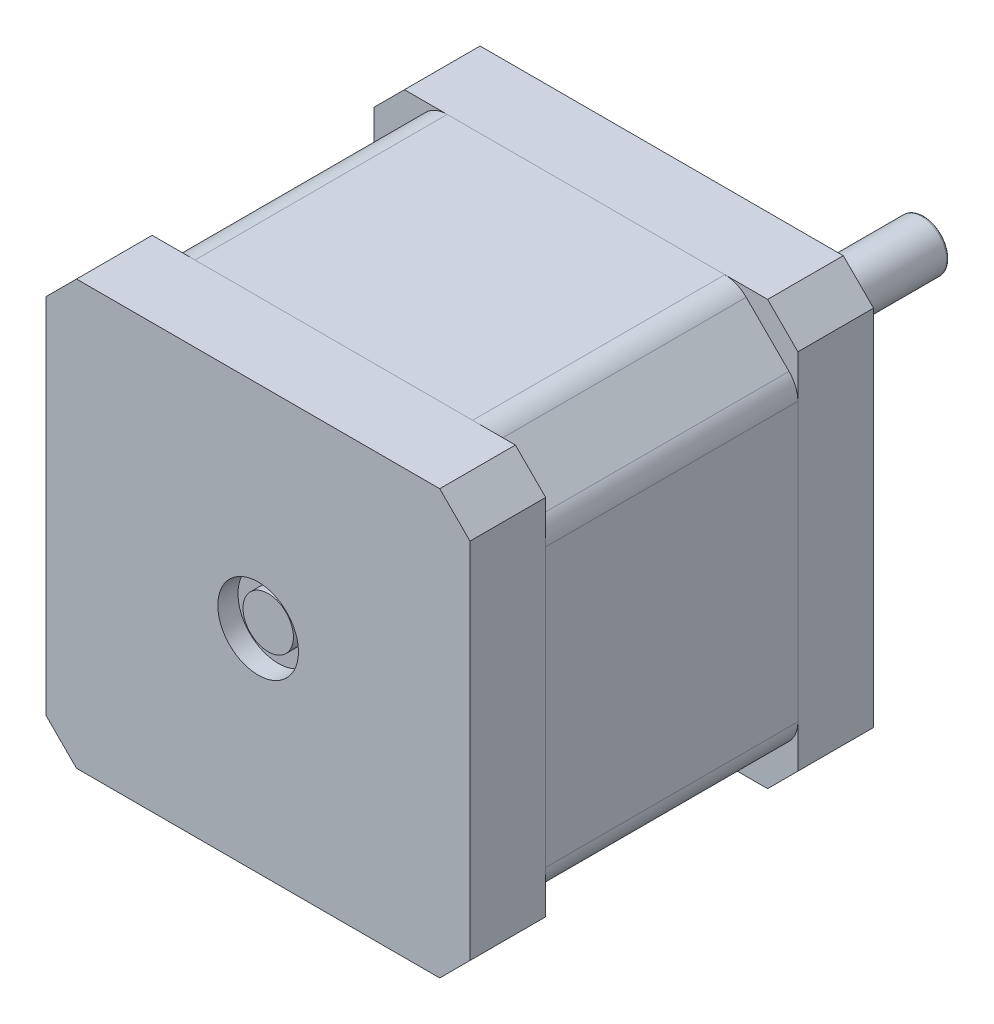
from build123d import *
from build123d.topology import SkipClean

# Parameters (mm, degrees)
IZIM1_R                     = 1.5
Y_KSEKLIK_EKSTR_ZYON1_DEPTH = 25
Y_KSEKLIK_EKSTR_ZYON2_START = 7.5
IZIM2_R                     = 1.5
Y_KSEKLIK_EKSTR_ZYON2_DEPTH = 7.5
IZIM3_R                     = 11
Y_KSEKLIK_EKSTR_ZYON3_DEPTH = 2
RADYUS1_R                   = 1
IZIM4_R                     = 4
KES_EKSTR_ZYON2_DEPTH       = 2
IZIM5_R                     = 2.5
Y_KSEKLIK_EKSTR_ZYON4_DEPTH = 26
IZIM6_W                     = 1.233072443
IZIM6_H                     = 4.616083878
KES_EKSTR_ZYON3_DEPTH       = 17
RADYUS2_R                   = 0.25
Y_KSEKLIK_EKSTR_ZYON5_DEPTH = 7.5
KES_EKSTR_ZYON4_START       = -2
IZIM8_R                     = 4
KES_EKSTR_ZYON4_DEPTH       = 2
Y_KSEKLIK_EKSTR_ZYON7_START = 1
IZIM10_R                    = 2.5
Y_KSEKLIK_EKSTR_ZYON7_DEPTH = 1
IZIM12_W                    = 1.322916666
IZIM12_H                    = 0.118723291
IZIM12_W_2                  = 1.356837607
Y_KSEKLIK_EKSTR_ZYON8_DEPTH = 0.1


with BuildPart() as part:
    # Çizim1 → Yükseklik-Ekstrüzyon1 (new body)
    with BuildSketch(Plane.XY):
        with BuildLine():
            Line((-15.878338215, 20.120978902), (-20.120978902, 15.878338215))
            ThreePointArc((-20.120978902, 15.878338215), (-20.771297156, 14.905068169), (-20.999658559, 13.757017872))
            Line((-20.999658559, 13.757017872), (-20.999658559, -13.757017872))
            ThreePointArc((-20.999658559, -13.757017872), (-20.771297156, -14.905068169), (-20.120978902, -15.878338215))
            Line((-20.120978902, -15.878338215), (-15.878338215, -20.120978902))
            ThreePointArc((-15.878338215, -20.120978902), (-14.905068169, -20.771297156), (-13.757017872, -20.999658559))
            Line((-13.757017872, -20.999658559), (13.757017872, -20.999658559))
            ThreePointArc((13.757017872, -20.999658559), (14.905068169, -20.771297156), (15.878338215, -20.120978902))
            Line((15.878338215, -20.120978902), (20.120978902, -15.878338215))
            ThreePointArc((20.120978902, -15.878338215), (20.771297156, -14.905068169), (20.999658559, -13.757017872))
            Line((20.999658559, -13.757017872), (20.999658559, 13.757017872))
            ThreePointArc((20.999658559, 13.757017872), (20.771297156, 14.905068169), (20.120978902, 15.878338215))
            Line((20.120978902, 15.878338215), (15.878338215, 20.120978902))
            ThreePointArc((15.878338215, 20.120978902), (14.905068169, 20.771297156), (13.757017872, 20.999658559))
            Line((13.757017872, 20.999658559), (-13.757017872, 20.999658559))
            ThreePointArc((-13.757017872, 20.999658559), (-14.905068169, 20.771297156), (-15.878338215, 20.120978902))
        make_face()
        with Locations((-15.5, 15.5)):
            Circle(IZIM1_R, mode=Mode.SUBTRACT)
        with Locations((15.5, 15.5)):
            Circle(IZIM1_R, mode=Mode.SUBTRACT)
        with Locations((15.5, -15.5)):
            Circle(IZIM1_R, mode=Mode.SUBTRACT)
        with Locations((-15.5, -15.5)):
            Circle(IZIM1_R, mode=Mode.SUBTRACT)
    extrude(amount=Y_KSEKLIK_EKSTR_ZYON1_DEPTH)

    # Çizim2 → Yükseklik-Ekstrüzyon2 (add)
    with SkipClean():  # the faces are left unmerged after this step: merging them gives an invalid solid
        with BuildSketch(Plane(origin=(0, 0, 0), x_dir=(-1, 0, 0), z_dir=(0, 0, -1)).offset(Y_KSEKLIK_EKSTR_ZYON2_START)):
            Polygon((-21, 18), (-18, 21), (18, 21), (21, 18), (21, -18), (18, -21), (-18, -21), (-21, -18), align=None)
            with Locations((-15.5, 15.5)):
                Circle(IZIM2_R, mode=Mode.SUBTRACT)
            with Locations((15.5, 15.5)):
                Circle(IZIM2_R, mode=Mode.SUBTRACT)
            with Locations((15.5, -15.5)):
                Circle(IZIM2_R, mode=Mode.SUBTRACT)
            with Locations((-15.5, -15.5)):
                Circle(IZIM2_R, mode=Mode.SUBTRACT)
        extrude(amount=-Y_KSEKLIK_EKSTR_ZYON2_DEPTH)

    # Çizim3 → Yükseklik-Ekstrüzyon3 (add)
    with SkipClean():  # the faces are left unmerged after this step: merging them gives an invalid solid
        with BuildSketch(Plane(origin=(0, 0, -7.5), x_dir=(-1, 0, 0), z_dir=(0, 0, -1))):
            Circle(IZIM3_R)
        extrude(amount=Y_KSEKLIK_EKSTR_ZYON3_DEPTH)

    # Radyus1
    radyus1_edges = [part.edges().sort_by_distance(p)[0] for p in [
        (11, 0, -7.5),
    ]]
    fillet(radyus1_edges, radius=RADYUS1_R)

    # Çizim4 → Kes-Ekstrüzyon2 (cut)
    with BuildSketch(Plane(origin=(0, 0, -9.5), x_dir=(-1, 0, 0), z_dir=(0, 0, -1))):
        Circle(IZIM4_R)
    extrude(amount=-KES_EKSTR_ZYON2_DEPTH, mode=Mode.SUBTRACT)

    # Çizim5 → Yükseklik-Ekstrüzyon4 (add)
    with BuildSketch(Plane(origin=(0, 0, -7.5), x_dir=(-1, 0, 0), z_dir=(0, 0, -1))):
        Circle(IZIM5_R)
    extrude(amount=Y_KSEKLIK_EKSTR_ZYON4_DEPTH)

    # Çizim6 → Kes-Ekstrüzyon3 (cut)
    with BuildSketch(Plane(origin=(0, 0, -33.5), x_dir=(-1, 0, 0), z_dir=(0, 0, -1))):
        with Locations((2.616536222, -0.191958061)):
            Rectangle(IZIM6_W, IZIM6_H)
    extrude(amount=-KES_EKSTR_ZYON3_DEPTH, mode=Mode.SUBTRACT)

    # Radyus2
    radyus2_edges = [part.edges().sort_by_distance(p)[0] for p in [
        (-2, 0, -33.5),
        (2.5, 0, -33.5),
    ]]
    fillet(radyus2_edges, radius=RADYUS2_R)

    # Çizim7 → Yükseklik-Ekstrüzyon5 (add)
    with BuildSketch(Plane.XY.offset(25)):
        Polygon((-18, 21), (18, 21), (21, 18), (21, -18), (18, -21), (-18, -21), (-21, -18), (-21, 18), align=None)
    extrude(amount=Y_KSEKLIK_EKSTR_ZYON5_DEPTH)

    # Çizim8 → Kes-Ekstrüzyon4 (cut)
    with BuildSketch(Plane.XY.offset(32.5).offset(KES_EKSTR_ZYON4_START)):
        Circle(IZIM8_R)
    extrude(amount=KES_EKSTR_ZYON4_DEPTH, mode=Mode.SUBTRACT)

    # Çizim10 → Yükseklik-Ekstrüzyon7 (add)
    with BuildSketch(Plane.XY.offset(30.5).offset(Y_KSEKLIK_EKSTR_ZYON7_START)):
        Circle(IZIM10_R)
    extrude(amount=-Y_KSEKLIK_EKSTR_ZYON7_DEPTH)

    # Çizim12 → Yükseklik-Ekstrüzyon8 (add)
    # profile 1 of 54: a face of its own
    with BuildSketch(Plane.ZY.offset(20.999658559)):
        with BuildLine():
            Line((7.410133378, -7.700053419), (7.34308652, -7.588220319))
            add(Edge.make_bspline(
                [(7.34308652, -7.588220319), (7.36049776, -7.577819081), (7.393857026, -7.557890709), (7.438933725, -7.524647189), (7.477246207, -7.490201119), (7.508571592, -7.454297412), (7.533234117, -7.417155224), (7.550697461, -7.378532084), (7.561589214, -7.33855815), (7.562912163, -7.311353759), (7.563572631, -7.297772269)],
                knots=[0, 0, 0, 0, 1.272034388, 2.437168799, 3.508375237, 4.49857839, 5.41946034, 6.295179144, 7.148887113, 8, 8, 8, 8], degree=3))
            add(Edge.make_bspline(
                [(7.563572631, -7.297772269), (7.563241899, -7.286175715), (7.562586224, -7.263185518), (7.55654057, -7.22927391), (7.546649892, -7.196503749), (7.533242008, -7.165200789), (7.516760804, -7.136194355), (7.49732637, -7.110350647), (7.474870578, -7.088528376), (7.450225308, -7.070437449), (7.423797314, -7.056438822), (7.396567019, -7.045858523), (7.368160805, -7.039932986), (7.349030489, -7.039043807), (7.339376417, -7.038595085)],
                knots=[0, 0, 0, 0, 1.09553864, 2.171907928, 3.244545276, 4.325730702, 5.384330216, 6.391480148, 7.371786628, 8.333890167, 9.27165687, 10.191402356, 11.087295184, 12, 12, 12, 12], degree=3))
            add(Edge.make_bspline(
                [(7.339376417, -7.038595085), (7.328358193, -7.039140371), (7.306045089, -7.040244634), (7.273068398, -7.049976578), (7.240293228, -7.064836848), (7.220015855, -7.078803832), (7.209522818, -7.0860314)],
                knots=[0, 0, 0, 0, 0.938992559, 1.901562324, 2.914110574, 4, 4, 4, 4], degree=3))
            add(Edge.make_bspline(
                [(7.209522818, -7.0860314), (7.201944638, -7.091953651), (7.186035197, -7.104386676), (7.16237361, -7.125779315), (7.137917249, -7.150754321), (7.112129208, -7.178969871), (7.085223682, -7.210473294), (7.056990712, -7.245276778), (7.028007242, -7.283677353), (7.008593923, -7.310630586), (6.998576971, -7.324538011)],
                knots=[0, 0, 0, 0, 0.72225051, 1.516274602, 2.393638633, 3.3469932, 4.386926276, 5.505032946, 6.712638081, 8, 8, 8, 8], degree=3))
            add(Edge.make_bspline(
                [(6.998576971, -7.324538011), (6.988663189, -7.338456605), (6.969708794, -7.365067896), (6.941578186, -7.402282896), (6.915859224, -7.435561607), (6.892309791, -7.464756116), (6.870926693, -7.489853583), (6.85191527, -7.511051777), (6.834761364, -7.527810695), (6.823633238, -7.537129918), (6.818636984, -7.541314019)],
                knots=[0, 0, 0, 0, 1.452282411, 2.77665338, 3.964542531, 5.026858415, 5.96415736, 6.766646006, 7.446254459, 8, 8, 8, 8], degree=3))
            add(Edge.make_bspline(
                [(6.818636984, -7.541314019), (6.810849896, -7.547161293), (6.795535542, -7.558660741), (6.771605762, -7.573856503), (6.747156339, -7.58667113), (6.722098665, -7.596984509), (6.696621062, -7.605324548), (6.670532254, -7.611123015), (6.644009348, -7.614697067), (6.626164386, -7.615066256), (6.617231401, -7.615251068)],
                knots=[0, 0, 0, 0, 1.068019517, 2.100403715, 3.106014851, 4.09224787, 5.069873182, 6.043214339, 7.020455327, 8, 8, 8, 8], degree=3))
            add(Edge.make_bspline(
                [(6.617231401, -7.615251068), (6.603235001, -7.614757752), (6.575541363, -7.613781665), (6.535086655, -7.605526151), (6.496461142, -7.592497405), (6.460056127, -7.574238627), (6.426786295, -7.550723512), (6.396352185, -7.523392346), (6.370417895, -7.491140826), (6.348111682, -7.455435996), (6.330471825, -7.416559596), (6.31768816, -7.3756312), (6.310094823, -7.332945015), (6.309035401, -7.303986), (6.308497844, -7.289292034)],
                knots=[0, 0, 0, 0, 1.005248779, 1.989011071, 2.95484373, 3.928844559, 4.904706341, 5.875556129, 6.859318422, 7.868909462, 8.894684146, 9.918924798, 10.944050749, 12, 12, 12, 12], degree=3))
            add(Edge.make_bspline(
                [(6.308497844, -7.289292034), (6.309028234, -7.273700222), (6.31008301, -7.242693084), (6.31948225, -7.19715613), (6.334441566, -7.153134146), (6.351992763, -7.117878326), (6.369410637, -7.090226948), (6.385310058, -7.069160409), (6.403576245, -7.047696583), (6.424594278, -7.026066143), (6.447943776, -7.004055551), (6.473822392, -6.981766193), (6.50199692, -6.95898948), (6.522115374, -6.944341511), (6.532429051, -6.936832265)],
                knots=[0, 0, 0, 0, 1.286507425, 2.558452658, 3.822738219, 5.118007103, 5.800084425, 6.519418873, 7.295692132, 8.12638276, 9.008892966, 9.945018126, 10.946518512, 12, 12, 12, 12], degree=3))
            Line((6.532429051, -6.936832265), (6.613786306, -7.04416024))
            add(Edge.make_bspline(
                [(6.613786306, -7.04416024), (6.605436824, -7.050640521), (6.589357673, -7.063120029), (6.566847561, -7.082074067), (6.546257648, -7.099911633), (6.52842074, -7.117620434), (6.512001139, -7.133835482), (6.498192787, -7.149852668), (6.486559406, -7.165053886), (6.474121772, -7.184168997), (6.462165698, -7.208383464), (6.451663692, -7.238526579), (6.445433341, -7.270133828), (6.444602308, -7.291650018), (6.444181605, -7.302542401)],
                knots=[0, 0, 0, 0, 1.181392137, 2.275085037, 3.289537922, 4.225335853, 5.084247276, 5.86831218, 6.587234301, 7.222706459, 8.415108401, 9.595592188, 10.782789524, 12, 12, 12, 12], degree=3))
            add(Edge.make_bspline(
                [(6.444181605, -7.302542401), (6.444632099, -7.316211931), (6.445500835, -7.342572331), (6.455238399, -7.379909194), (6.470043709, -7.413708372), (6.491392811, -7.442679587), (6.516845053, -7.466600671), (6.545871543, -7.484118996), (6.577930171, -7.494592895), (6.600282543, -7.495874882), (6.611666247, -7.496527778)],
                knots=[0, 0, 0, 0, 1.144248881, 2.206576175, 3.214949548, 4.222996039, 5.203671638, 6.127710127, 7.046472867, 8, 8, 8, 8], degree=3))
            add(Edge.make_bspline(
                [(6.611666247, -7.496527778), (6.618752234, -7.496370697), (6.633022919, -7.496054346), (6.654006309, -7.492011897), (6.674879059, -7.486546175), (6.69556771, -7.47816696), (6.716540742, -7.466498209), (6.738094381, -7.451191307), (6.760414279, -7.431908532), (6.774931388, -7.417138496), (6.782595985, -7.409340361)],
                knots=[0, 0, 0, 0, 0.858259122, 1.72847414, 2.583651051, 3.473048463, 4.427392529, 5.488649985, 6.674082839, 8, 8, 8, 8], degree=3))
            add(Edge.make_bspline(
                [(6.782595985, -7.409340361), (6.785180218, -7.406444545), (6.791319764, -7.399564748), (6.801371013, -7.38698724), (6.81376968, -7.370377909), (6.829110719, -7.35017047), (6.846906391, -7.32599233), (6.866929155, -7.297840831), (6.889829016, -7.266029776), (6.905839157, -7.243456313), (6.914304635, -7.231520433)],
                knots=[0, 0, 0, 0, 0.420754252, 0.999615792, 1.744751191, 2.668019286, 3.750313428, 4.999500688, 6.413464383, 8, 8, 8, 8], degree=3))
            add(Edge.make_bspline(
                [(6.914304635, -7.231520433), (6.924752418, -7.217162672), (6.944983102, -7.189360858), (6.975378215, -7.149802648), (7.005105541, -7.113935517), (7.03397331, -7.081630885), (7.061769002, -7.052578493), (7.088805477, -7.027071206), (7.114905432, -7.004993291), (7.148139652, -6.980900237), (7.189334684, -6.956573395), (7.239829118, -6.935715127), (7.290468456, -6.922445454), (7.324460196, -6.92072209), (7.341231468, -6.919871795)],
                knots=[0, 0, 0, 0, 1.163604038, 2.253157948, 3.268574773, 4.215621239, 5.091738613, 5.902582348, 6.650434646, 7.330118262, 8.591011492, 9.77460283, 10.902005569, 12, 12, 12, 12], degree=3))
            add(Edge.make_bspline(
                [(7.341231468, -6.919871795), (7.353091617, -6.920120431), (7.3765816, -6.920612874), (7.411075673, -6.926264062), (7.444569237, -6.934562864), (7.476615159, -6.946970264), (7.507727624, -6.962360899), (7.537320534, -6.981610151), (7.565968816, -7.004039174), (7.592869309, -7.029754736), (7.617594329, -7.057879064), (7.639497485, -7.087711534), (7.658181052, -7.118940723), (7.673060681, -7.151904821), (7.684776614, -7.186249706), (7.693241625, -7.222088636), (7.698442725, -7.259457914), (7.698982141, -7.28485824), (7.699256391, -7.297772269)],
                knots=[0, 0, 0, 0, 0.983922938, 1.948738757, 2.895227473, 3.844781104, 4.796118043, 5.772795661, 6.770647148, 7.813532943, 8.8582745, 9.876489951, 10.882905461, 11.874265028, 12.874055871, 13.891769171, 14.928133632, 16, 16, 16, 16], degree=3))
            add(Edge.make_bspline(
                [(7.699256391, -7.297772269), (7.699063177, -7.307764199), (7.698679181, -7.327622222), (7.695284471, -7.356994556), (7.690481488, -7.385773506), (7.682856174, -7.413597958), (7.673604442, -7.440826364), (7.662212935, -7.467340424), (7.648561248, -7.49315253), (7.632953651, -7.518409086), (7.614785313, -7.543039089), (7.593643233, -7.566838227), (7.570066528, -7.590432592), (7.543690977, -7.613654811), (7.514226541, -7.635998249), (7.482112104, -7.657999302), (7.447252166, -7.679550746), (7.422737408, -7.693091546), (7.410133378, -7.700053419)],
                knots=[0, 0, 0, 0, 0.915313873, 1.819100311, 2.706792138, 3.586475221, 4.459428225, 5.3405999, 6.2277379, 7.133009489, 8.059106158, 9.028520402, 10.047404263, 11.114294124, 12.246039232, 13.433834781, 14.680630578, 16, 16, 16, 16], degree=3))
        make_face()
    # profile 2 of 54: a face of its own
    with BuildSketch(Plane.ZY.offset(20.999658559)):
        Polygon((6.478102545, -6.801148504), (6.342418785, -6.801148504), (6.342418785, -6.105769231), (6.478102545, -6.105769231), (6.478102545, -6.394097222), (7.665335451, -6.394097222), (7.665335451, -6.512820513), (6.478102545, -6.512820513), align=None)
    # profile 3 of 54: a face of its own
    with BuildSketch(Plane.ZY.offset(20.999658559)):
        Polygon((6.342418785, -5.86832265), (6.342418785, -5.122061966), (6.478102545, -5.122061966), (6.478102545, -5.749599359), (6.885153827, -5.749599359), (6.885153827, -5.122061966), (7.020837588, -5.122061966), (7.020837588, -5.749599359), (7.529651691, -5.749599359), (7.529651691, -5.122061966), (7.665335451, -5.122061966), (7.665335451, -5.86832265), align=None)
    # profile 4 of 54: a face of its own
    with BuildSketch(Plane.ZY.offset(20.999658559)):
        with BuildLine():
            Line((6.342418785, -4.884615385), (6.342418785, -4.625173194))
            add(Edge.make_bspline(
                [(6.342418785, -4.625173194), (6.3424384, -4.607328595), (6.342475984, -4.573137552), (6.343615486, -4.52410835), (6.34513748, -4.479579076), (6.347247303, -4.439645748), (6.349740657, -4.404185496), (6.353237708, -4.373358779), (6.356889069, -4.346923292), (6.360601327, -4.331083652), (6.362294335, -4.323859842)],
                knots=[0, 0, 0, 0, 1.415646017, 2.712440637, 3.8905458, 4.950247383, 5.884950622, 6.709939814, 7.411656543, 8, 8, 8, 8], degree=3))
            add(Edge.make_bspline(
                [(6.362294335, -4.323859842), (6.364797373, -4.314715342), (6.369744466, -4.296641821), (6.379651213, -4.270597713), (6.391404792, -4.245824205), (6.40477475, -4.222210724), (6.42041922, -4.200187354), (6.437297441, -4.179019933), (6.456500154, -4.159455669), (6.477421702, -4.141229568), (6.499796733, -4.124383688), (6.524031773, -4.110230103), (6.549403275, -4.097854649), (6.576256059, -4.087722237), (6.604616194, -4.080187354), (6.634282136, -4.074593463), (6.665287244, -4.071026591), (6.686476824, -4.070686134), (6.69726362, -4.070512821)],
                knots=[0, 0, 0, 0, 0.999549623, 1.97554611, 2.93413192, 3.889860808, 4.833293765, 5.780583482, 6.742559327, 7.719844669, 8.705620613, 9.691528643, 10.674968152, 11.680406189, 12.713313868, 13.765869198, 14.862690416, 16, 16, 16, 16], degree=3))
            add(Edge.make_bspline(
                [(6.69726362, -4.070512821), (6.708140934, -4.070672109), (6.729423134, -4.070983768), (6.760558087, -4.074724328), (6.790311764, -4.079762823), (6.818618194, -4.087510221), (6.845309273, -4.097657246), (6.870792894, -4.109560492), (6.894635508, -4.123917362), (6.916923674, -4.140414069), (6.937678314, -4.158765415), (6.956749025, -4.178893758), (6.974024177, -4.200717836), (6.989542497, -4.224168291), (7.002944126, -4.24947374), (7.014947632, -4.276250387), (7.025028657, -4.304730975), (7.030331687, -4.324439603), (7.033027926, -4.334460136)],
                knots=[0, 0, 0, 0, 1.121902311, 2.195077645, 3.232258892, 4.234102512, 5.217864754, 6.176164875, 7.132989551, 8.084763148, 9.034132444, 9.988522005, 10.94243251, 11.903244335, 12.886203696, 13.894208494, 14.929344452, 16, 16, 16, 16], degree=3))
            add(Edge.make_bspline(
                [(7.033027926, -4.334460136), (7.034789108, -4.342748241), (7.038648842, -4.360912104), (7.042987074, -4.390824293), (7.046544898, -4.425668641), (7.049865088, -4.465326593), (7.051624374, -4.509890629), (7.053690063, -4.559258542), (7.054664748, -4.613597409), (7.05472636, -4.651497075), (7.054758528, -4.671284472)],
                knots=[0, 0, 0, 0, 0.601372724, 1.317943291, 2.144091499, 3.08771165, 4.142394186, 5.309582461, 6.595334295, 8, 8, 8, 8], degree=3))
            Line((7.054758528, -4.671284472), (7.054758528, -4.765892094))
            Line((7.054758528, -4.765892094), (7.665335451, -4.765892094))
            Line((7.665335451, -4.765892094), (7.665335451, -4.884615385))
            Line((7.665335451, -4.884615385), (6.342418785, -4.884615385))
        make_face()
        with BuildLine():
            Line((6.478102545, -4.765892094), (6.919074767, -4.765892094))
            Line((6.919074767, -4.765892094), (6.921989848, -4.534275674))
            add(Edge.make_bspline(
                [(6.921989848, -4.534275674), (6.921996076, -4.522966576), (6.922008097, -4.501134594), (6.920496662, -4.469598746), (6.918775131, -4.440336289), (6.916171416, -4.413457262), (6.912758357, -4.388867353), (6.908513877, -4.366778957), (6.903899452, -4.346861707), (6.896189893, -4.323950769), (6.884335655, -4.29819812), (6.867079167, -4.270065317), (6.844724212, -4.246407722), (6.819659579, -4.225973134), (6.791851302, -4.209437792), (6.761941601, -4.197772768), (6.730373585, -4.190589928), (6.708785412, -4.18969286), (6.697793634, -4.189236111)],
                knots=[0, 0, 0, 0, 1.160746174, 2.240796558, 3.240300023, 4.169675897, 5.012224395, 5.787635701, 6.478238024, 7.109103438, 8.265591281, 9.382545711, 10.479929969, 11.588830844, 12.694575677, 13.785760505, 14.872603606, 16, 16, 16, 16], degree=3))
            add(Edge.make_bspline(
                [(6.697793634, -4.189236111), (6.687157957, -4.189713366), (6.666015546, -4.19066209), (6.635029373, -4.197713492), (6.605458724, -4.209563053), (6.577874391, -4.22598759), (6.552864911, -4.245926262), (6.531102271, -4.269082266), (6.513724279, -4.295514843), (6.502075761, -4.31989827), (6.495255964, -4.341733328), (6.490330274, -4.360605607), (6.486933671, -4.382023437), (6.483683545, -4.405783316), (6.481060045, -4.431855077), (6.479238187, -4.460404425), (6.478183137, -4.49133629), (6.47813006, -4.512809232), (6.478102545, -4.523940388)],
                knots=[0, 0, 0, 0, 1.120540835, 2.227496496, 3.330685923, 4.466139262, 5.598993257, 6.692710361, 7.80064471, 8.921224235, 9.527843361, 10.209888745, 10.975318552, 11.811557897, 12.738105936, 13.73658638, 14.826690375, 16, 16, 16, 16], degree=3))
            Line((6.478102545, -4.523940388), (6.478102545, -4.765892094))
        make_face(mode=Mode.SUBTRACT)
    # profile 5 of 54: a face of its own
    with BuildSketch(Plane.ZY.offset(20.999658559)):
        with BuildLine():
            Line((6.342418785, -3.799145299), (6.342418785, -3.539703108))
            add(Edge.make_bspline(
                [(6.342418785, -3.539703108), (6.3424384, -3.52185851), (6.342475984, -3.487667467), (6.343615486, -3.438638264), (6.34513748, -3.394108991), (6.347247303, -3.354175662), (6.349740657, -3.318715411), (6.353237708, -3.287888693), (6.356889069, -3.261453206), (6.360601327, -3.245613566), (6.362294335, -3.238389757)],
                knots=[0, 0, 0, 0, 1.415646017, 2.712440637, 3.8905458, 4.950247383, 5.884950622, 6.709939814, 7.411656543, 8, 8, 8, 8], degree=3))
            add(Edge.make_bspline(
                [(6.362294335, -3.238389757), (6.364797373, -3.229245257), (6.369744466, -3.211171736), (6.379651213, -3.185127628), (6.391404792, -3.160354119), (6.40477475, -3.136740639), (6.42041922, -3.114717269), (6.437297441, -3.093549847), (6.456500154, -3.073985584), (6.477421702, -3.055759482), (6.499796733, -3.038913603), (6.524031773, -3.024760017), (6.549403275, -3.012384564), (6.576256059, -3.002252151), (6.604616194, -2.994717269), (6.634282136, -2.989123377), (6.665287244, -2.985556506), (6.686476824, -2.985216049), (6.69726362, -2.985042735)],
                knots=[0, 0, 0, 0, 0.999549623, 1.97554611, 2.93413192, 3.889860808, 4.833293765, 5.780583482, 6.742559327, 7.719844669, 8.705620613, 9.691528643, 10.674968152, 11.680406189, 12.713313868, 13.765869198, 14.862690416, 16, 16, 16, 16], degree=3))
            add(Edge.make_bspline(
                [(6.69726362, -2.985042735), (6.708140934, -2.985202024), (6.729423134, -2.985513682), (6.760558087, -2.989254243), (6.790311764, -2.994292738), (6.818618194, -3.002040135), (6.845309273, -3.012187161), (6.870792894, -3.024090407), (6.894635508, -3.038447277), (6.916923674, -3.054943983), (6.937678314, -3.07329533), (6.956749025, -3.093423673), (6.974024177, -3.115247751), (6.989542497, -3.138698205), (7.002944126, -3.164003654), (7.014947632, -3.190780301), (7.025028657, -3.219260889), (7.030331687, -3.238969518), (7.033027926, -3.248990051)],
                knots=[0, 0, 0, 0, 1.121902311, 2.195077645, 3.232258892, 4.234102512, 5.217864754, 6.176164875, 7.132989551, 8.084763148, 9.034132444, 9.988522005, 10.94243251, 11.903244335, 12.886203696, 13.894208494, 14.929344452, 16, 16, 16, 16], degree=3))
            add(Edge.make_bspline(
                [(7.033027926, -3.248990051), (7.034789108, -3.257278155), (7.038648842, -3.275442018), (7.042987074, -3.305354207), (7.046544898, -3.340198556), (7.049865088, -3.379856507), (7.051624374, -3.424420544), (7.053690063, -3.473788457), (7.054664748, -3.528127324), (7.05472636, -3.566026989), (7.054758528, -3.585814386)],
                knots=[0, 0, 0, 0, 0.601372724, 1.317943291, 2.144091499, 3.08771165, 4.142394186, 5.309582461, 6.595334295, 8, 8, 8, 8], degree=3))
            Line((7.054758528, -3.585814386), (7.054758528, -3.680422009))
            Line((7.054758528, -3.680422009), (7.665335451, -3.680422009))
            Line((7.665335451, -3.680422009), (7.665335451, -3.799145299))
            Line((7.665335451, -3.799145299), (6.342418785, -3.799145299))
        make_face()
        with BuildLine():
            Line((6.478102545, -3.680422009), (6.919074767, -3.680422009))
            Line((6.919074767, -3.680422009), (6.921989848, -3.448805589))
            add(Edge.make_bspline(
                [(6.921989848, -3.448805589), (6.921996076, -3.43749649), (6.922008097, -3.415664508), (6.920496662, -3.38412866), (6.918775131, -3.354866203), (6.916171416, -3.327987177), (6.912758357, -3.303397267), (6.908513877, -3.281308871), (6.903899452, -3.261391621), (6.896189893, -3.238480683), (6.884335655, -3.212728034), (6.867079167, -3.184595231), (6.844724212, -3.160937636), (6.819659579, -3.140503048), (6.791851302, -3.123967707), (6.761941601, -3.112302683), (6.730373585, -3.105119842), (6.708785412, -3.104222774), (6.697793634, -3.103766026)],
                knots=[0, 0, 0, 0, 1.160746174, 2.240796558, 3.240300023, 4.169675897, 5.012224395, 5.787635701, 6.478238024, 7.109103438, 8.265591281, 9.382545711, 10.479929969, 11.588830844, 12.694575677, 13.785760505, 14.872603606, 16, 16, 16, 16], degree=3))
            add(Edge.make_bspline(
                [(6.697793634, -3.103766026), (6.687157957, -3.104243281), (6.666015546, -3.105192005), (6.635029373, -3.112243407), (6.605458724, -3.124092967), (6.577874391, -3.140517504), (6.552864911, -3.160456176), (6.531102271, -3.183612181), (6.513724279, -3.210044757), (6.502075761, -3.234428184), (6.495255964, -3.256263243), (6.490330274, -3.275135522), (6.486933671, -3.296553352), (6.483683545, -3.320313231), (6.481060045, -3.346384991), (6.479238187, -3.37493434), (6.478183137, -3.405866204), (6.47813006, -3.427339147), (6.478102545, -3.438470302)],
                knots=[0, 0, 0, 0, 1.120540835, 2.227496496, 3.330685923, 4.466139262, 5.598993257, 6.692710361, 7.80064471, 8.921224235, 9.527843361, 10.209888745, 10.975318552, 11.811557897, 12.738105936, 13.73658638, 14.826690375, 16, 16, 16, 16], degree=3))
            Line((6.478102545, -3.438470302), (6.478102545, -3.680422009))
        make_face(mode=Mode.SUBTRACT)
    # profile 6 of 54: a face of its own
    with BuildSketch(Plane.ZY.offset(20.999658559)):
        with Locations((7.003877118, -2.654313569)):
            Rectangle(IZIM12_W, IZIM12_H)
    # profile 7 of 54: a face of its own
    with BuildSketch(Plane.ZY.offset(20.999658559)):
        Polygon((7.665335451, -2.306623932), (6.342418785, -2.306623932), (6.342418785, -2.281713241), (7.383632643, -1.407719017), (6.342418785, -1.407719017), (6.342418785, -1.288995726), (7.665335451, -1.288995726), (7.665335451, -1.316026476), (6.626506658, -2.187900641), (7.665335451, -2.187900641), align=None)
    # profile 8 of 54: a face of its own
    with BuildSketch(Plane.ZY.offset(20.999658559)):
        with BuildLine():
            Line((6.568205043, 0.288327991), (6.664667716, 0.186565171))
            add(Edge.make_bspline(
                [(6.664667716, 0.186565171), (6.647338936, 0.168154298), (6.61309459, 0.131771571), (6.568734268, 0.072353735), (6.530357239, 0.010609112), (6.499364858, -0.053562135), (6.475052802, -0.118477278), (6.457380161, -0.183020097), (6.446188225, -0.246772698), (6.444843984, -0.289168134), (6.444181605, -0.310058594)],
                knots=[0, 0, 0, 0, 1.089067066, 2.152164705, 3.18986567, 4.218445106, 5.218487318, 6.173592265, 7.100032889, 8, 8, 8, 8], degree=3))
            add(Edge.make_bspline(
                [(6.444181605, -0.310058594), (6.444337938, -0.322877543), (6.444650199, -0.348482194), (6.448635661, -0.386514894), (6.454367619, -0.424148712), (6.462661126, -0.461312606), (6.473172288, -0.498078837), (6.486320367, -0.53431953), (6.501649279, -0.570102298), (6.519362195, -0.605090049), (6.538820287, -0.63900991), (6.560383512, -0.671045658), (6.583359371, -0.701403369), (6.608328204, -0.729505599), (6.635045188, -0.755539281), (6.663029172, -0.779983266), (6.692830354, -0.802381976), (6.724326184, -0.822333691), (6.756783927, -0.840350906), (6.789928308, -0.855920577), (6.823451641, -0.869455887), (6.85760635, -0.879764795), (6.892040314, -0.888496376), (6.926933984, -0.8945747), (6.962378481, -0.898012891), (6.986114516, -0.898606499), (6.998046956, -0.898904915)],
                knots=[0, 0, 0, 0, 1.028150113, 2.053633673, 3.06513288, 4.081487945, 5.106702018, 6.131327874, 7.172780699, 8.228344599, 9.276313556, 10.308389736, 11.324843658, 12.329040066, 13.321460474, 14.316307835, 15.308626991, 16.309440696, 17.305625405, 18.28535951, 19.246194545, 20.203493668, 21.145557131, 22.095268976, 23.042464743, 24, 24, 24, 24], degree=3))
            add(Edge.make_bspline(
                [(6.998046956, -0.898904915), (7.010244498, -0.898619091), (7.034606274, -0.898048224), (7.070966223, -0.894399545), (7.106781955, -0.887612903), (7.142109803, -0.878612629), (7.177020076, -0.867170278), (7.211476341, -0.853112393), (7.24547525, -0.83636573), (7.278679293, -0.817024209), (7.310996307, -0.795664975), (7.341692691, -0.772173308), (7.370411215, -0.746509656), (7.397571353, -0.719144579), (7.423001696, -0.689828747), (7.44639572, -0.65827774), (7.46811517, -0.624933212), (7.487921438, -0.589780372), (7.505613508, -0.553190773), (7.521346469, -0.515674205), (7.53430321, -0.477110087), (7.544863157, -0.437701282), (7.553518922, -0.397494715), (7.559087449, -0.356286314), (7.563128328, -0.31437907), (7.563423781, -0.286129647), (7.563572631, -0.271897536)],
                knots=[0, 0, 0, 0, 0.935915162, 1.869274651, 2.799799983, 3.730201895, 4.664668062, 5.616159355, 6.583070886, 7.570012957, 8.562524459, 9.553461134, 10.53281078, 11.515274572, 12.509912756, 13.507571325, 14.526460018, 15.561318395, 16.601025881, 17.643204557, 18.680545676, 19.719612342, 20.772381578, 21.833430283, 22.908478249, 24, 24, 24, 24], degree=3))
            add(Edge.make_bspline(
                [(7.563572631, -0.271897536), (7.56321424, -0.254745531), (7.562510482, -0.221064784), (7.557027608, -0.171556018), (7.548475341, -0.124001844), (7.535911771, -0.078557072), (7.520009387, -0.035056777), (7.500343823, 0.006338604), (7.477121992, 0.045743375), (7.450814133, 0.08298698), (7.421502659, 0.117184006), (7.390155315, 0.148307351), (7.35636597, 0.17528677), (7.320638205, 0.198928167), (7.282630278, 0.218468494), (7.242553627, 0.234512026), (7.200383457, 0.24680852), (7.171244698, 0.251856425), (7.156521349, 0.254407051)],
                knots=[0, 0, 0, 0, 1.130199668, 2.219330667, 3.279027493, 4.311506524, 5.322739849, 6.327972234, 7.327472899, 8.33386792, 9.329086447, 10.29244429, 11.240784345, 12.174119183, 13.111530729, 14.052100829, 15.015757696, 16, 16, 16, 16], degree=3))
            Line((7.156521349, 0.254407051), (7.156521349, -0.186565171))
            Line((7.156521349, -0.186565171), (7.020837588, -0.186565171))
            Line((7.020837588, -0.186565171), (7.020837588, 0.373130342))
            add(Edge.make_bspline(
                [(7.020837588, 0.373130342), (7.046127026, 0.372485572), (7.095623024, 0.37122364), (7.167805239, 0.362371848), (7.235981445, 0.348078107), (7.300223439, 0.328551739), (7.360440184, 0.303274475), (7.416692818, 0.272517597), (7.468617932, 0.235788849), (7.516639431, 0.194396509), (7.559475175, 0.147943251), (7.597123848, 0.097684279), (7.628837038, 0.043536556), (7.654637944, -0.014448699), (7.674774245, -0.07608166), (7.689051002, -0.141504947), (7.697604589, -0.210629838), (7.698697462, -0.258004117), (7.699256391, -0.282232823)],
                knots=[0, 0, 0, 0, 1.140356446, 2.231883559, 3.274166699, 4.278491846, 5.25512956, 6.21435461, 7.1637429, 8.11826594, 9.068280886, 10.0076534, 10.945064095, 11.891975133, 12.864533718, 13.863980011, 14.907571808, 16, 16, 16, 16], degree=3))
            add(Edge.make_bspline(
                [(7.699256391, -0.282232823), (7.699041277, -0.297166713), (7.698617002, -0.326621158), (7.695601755, -0.370122789), (7.69095999, -0.412424984), (7.683950374, -0.453521583), (7.675364776, -0.493563754), (7.664370689, -0.532351514), (7.651644722, -0.570032619), (7.637169869, -0.60666531), (7.62039844, -0.641917088), (7.60176057, -0.675944968), (7.581352365, -0.708937045), (7.558820885, -0.740668587), (7.534334657, -0.771304926), (7.507844605, -0.800648519), (7.479431711, -0.828863639), (7.459255716, -0.846537981), (7.449089458, -0.85544371)],
                knots=[0, 0, 0, 0, 1.107784379, 2.184907829, 3.233506516, 4.263428166, 5.276301166, 6.270063455, 7.25232949, 8.225834625, 9.190232166, 10.146266622, 11.1027726, 12.066435141, 13.031522626, 14.010570082, 14.99756817, 16, 16, 16, 16], degree=3))
            add(Edge.make_bspline(
                [(7.449089458, -0.85544371), (7.432960967, -0.868365178), (7.400971701, -0.893993632), (7.349718151, -0.926982697), (7.296649591, -0.955104656), (7.241618288, -0.977922255), (7.184675716, -0.99573933), (7.125894639, -1.008517288), (7.065199362, -1.016003972), (7.024126479, -1.017082541), (7.003347103, -1.017628205)],
                knots=[0, 0, 0, 0, 1.023165419, 2.029347347, 3.013907458, 3.994755782, 4.975994455, 5.96558838, 6.970761222, 8, 8, 8, 8], degree=3))
            add(Edge.make_bspline(
                [(7.003347103, -1.017628205), (6.98778724, -1.017427032), (6.956865269, -1.017027242), (6.9109573, -1.012179502), (6.865864476, -1.005224206), (6.821623673, -0.995001055), (6.778205295, -0.982113509), (6.735589357, -0.966029193), (6.693750056, -0.947302825), (6.652977845, -0.925535283), (6.613804539, -0.901318825), (6.576421836, -0.875008789), (6.541435597, -0.846402158), (6.508764775, -0.815415634), (6.477925148, -0.782673851), (6.449560908, -0.747489445), (6.4232282, -0.710395491), (6.399433008, -0.671104435), (6.378051706, -0.630236277), (6.359308592, -0.587879855), (6.343817759, -0.54405056), (6.33067413, -0.499076097), (6.320954411, -0.452616216), (6.313905631, -0.40500802), (6.309082428, -0.356003365), (6.308694527, -0.322879033), (6.308497844, -0.306083484)],
                knots=[0, 0, 0, 0, 1.00895651, 2.005089799, 2.991467152, 3.967318338, 4.948153826, 5.927364234, 6.919980553, 7.91976625, 8.923240147, 9.905815003, 10.88314567, 11.851989312, 12.825009789, 13.798721852, 14.781296708, 15.773896486, 16.776076962, 17.771600213, 18.775744723, 19.78957137, 20.808953803, 21.851964491, 22.910847925, 24, 24, 24, 24], degree=3))
            add(Edge.make_bspline(
                [(6.308497844, -0.306083484), (6.308716878, -0.29238629), (6.309151197, -0.265226366), (6.312161645, -0.224810985), (6.316933171, -0.185020292), (6.323444486, -0.145795287), (6.332313203, -0.107269547), (6.342926126, -0.069333322), (6.355282856, -0.03193162), (6.370019712, 0.004818343), (6.386746528, 0.041163671), (6.405574816, 0.07730645), (6.426826529, 0.113123188), (6.45056477, 0.148676), (6.476381836, 0.184189077), (6.505016112, 0.219100713), (6.535338403, 0.254253611), (6.557140895, 0.276857273), (6.568205043, 0.288327991)],
                knots=[0, 0, 0, 0, 0.985871117, 1.954866573, 2.915460327, 3.869826059, 4.81536089, 5.759505086, 6.70452669, 7.649098992, 8.607881297, 9.583363685, 10.581137262, 11.603961102, 12.659522466, 13.73993555, 14.853081303, 16, 16, 16, 16], degree=3))
        make_face()
    # profile 9 of 54: a face of its own
    with BuildSketch(Plane.ZY.offset(20.999658559)):
        Polygon((7.665335451, 1.085470085), (6.342418785, 1.260109926), (6.342418785, 1.277070396), (7.42788887, 1.823250534), (6.342418785, 2.368105636), (6.342418785, 2.385331113), (7.665335451, 2.561030983), (7.665335451, 2.441777678), (6.713429068, 2.315104167), (7.665335451, 1.837560931), (7.665335451, 1.810795189), (6.711309009, 1.331396902), (7.665335451, 1.204988398), align=None)
    # profile 10 of 54: a face of its own
    with BuildSketch(Plane.ZY.offset(20.999658559)):
        with BuildLine():
            add(Edge.make_bspline(
                [(6.308497844, 3.451455662), (6.30910784, 3.475954254), (6.310305921, 3.52407151), (6.319779813, 3.594723395), (6.335372849, 3.662375742), (6.357393545, 3.727067445), (6.385940611, 3.788552465), (6.42061712, 3.847004452), (6.461633808, 3.902248231), (6.508388386, 3.953903536), (6.559592278, 4.001025142), (6.614407016, 4.042374596), (6.672143434, 4.077256762), (6.732804543, 4.105811614), (6.796248716, 4.128229066), (6.862831525, 4.143694402), (6.932116873, 4.153574298), (6.979374081, 4.154729268), (7.003347103, 4.155315171)],
                knots=[0, 0, 0, 0, 1.065064174, 2.09187391, 3.093564831, 4.079973196, 5.057907931, 6.036227367, 7.030399151, 8.044883615, 9.061699972, 10.052012555, 11.025713132, 11.989727027, 12.962874294, 13.945865945, 14.957962116, 16, 16, 16, 16], degree=3))
            add(Edge.make_bspline(
                [(7.003347103, 4.155315171), (7.027143396, 4.154729071), (7.074048645, 4.1535738), (7.142896298, 4.143686386), (7.20906992, 4.128160059), (7.272422016, 4.106089173), (7.33295992, 4.077512409), (7.390740046, 4.042578891), (7.445701194, 4.001307914), (7.49725784, 3.95438641), (7.544420234, 3.903084974), (7.586019302, 3.848480904), (7.620916653, 3.790746026), (7.649790295, 3.730478643), (7.67174057, 3.667205516), (7.687721095, 3.601387085), (7.697502911, 3.53266475), (7.698665484, 3.48585049), (7.699256391, 3.462055956)],
                knots=[0, 0, 0, 0, 1.043748596, 2.057349401, 3.045489418, 4.02252776, 4.995289225, 5.97782527, 6.980224157, 8.006516136, 9.032559198, 10.034193337, 11.013412982, 11.987833483, 12.961212594, 13.946489799, 14.956251404, 16, 16, 16, 16], degree=3))
            add(Edge.make_bspline(
                [(7.699256391, 3.462055956), (7.69867076, 3.438083074), (7.697516325, 3.390826141), (7.687620377, 3.321453511), (7.672145539, 3.254824721), (7.650030365, 3.191130309), (7.621448852, 3.130334755), (7.586597793, 3.072319158), (7.545244498, 3.017316385), (7.498312489, 2.965782452), (7.447220861, 2.918630225), (7.392476961, 2.87752177), (7.335154809, 2.842662873), (7.275095328, 2.814177328), (7.21258886, 2.791625583), (7.147218454, 2.776240131), (7.079356795, 2.766285768), (7.03315189, 2.765138668), (7.009707279, 2.764556624)],
                knots=[0, 0, 0, 0, 1.053102029, 2.075944431, 3.073151272, 4.055350789, 5.033113405, 6.020478099, 7.024410459, 8.052272461, 9.079885166, 10.07527673, 11.055994387, 12.023226415, 12.992069828, 13.970394897, 14.97016774, 16, 16, 16, 16], degree=3))
            add(Edge.make_bspline(
                [(7.009707279, 2.764556624), (6.993971122, 2.764758703), (6.962697325, 2.765160313), (6.916256676, 2.769995268), (6.870562885, 2.777011149), (6.82574589, 2.787066039), (6.781915399, 2.800216461), (6.738769128, 2.81573315), (6.696744328, 2.834684817), (6.655641915, 2.856108753), (6.616102617, 2.88002021), (6.578728489, 2.90643158), (6.54320591, 2.934415186), (6.510455406, 2.965093016), (6.479524232, 2.997453994), (6.450887729, 3.032023084), (6.424287673, 3.068589349), (6.400316294, 3.107310129), (6.378635907, 3.147231322), (6.360031219, 3.188384152), (6.344063214, 3.230209701), (6.331120997, 3.272903869), (6.320903531, 3.31635328), (6.31394599, 3.360652764), (6.309098703, 3.405767029), (6.308698992, 3.436160593), (6.308497844, 3.451455662)],
                knots=[0, 0, 0, 0, 1.037015668, 2.060948919, 3.074880161, 4.083647147, 5.086022904, 6.090072063, 7.104153813, 8.122640571, 9.144368836, 10.147691507, 11.138137339, 12.123020368, 13.103399296, 14.087645067, 15.080126199, 16.082011238, 17.087798457, 18.072939717, 19.057185487, 20.037253025, 21.01195951, 21.997135196, 22.992090687, 24, 24, 24, 24], degree=3))
        make_face()
        with BuildLine():
            add(Edge.make_bspline(
                [(6.444181605, 3.457285824), (6.44433411, 3.444731323), (6.444637663, 3.419742342), (6.448658042, 3.382595501), (6.454347066, 3.345925922), (6.462609524, 3.309804565), (6.473296654, 3.274155677), (6.486186177, 3.238963431), (6.501765098, 3.20434849), (6.519285486, 3.170354097), (6.539185845, 3.137765413), (6.560318082, 3.106503953), (6.583467375, 3.077382855), (6.608133084, 3.050002077), (6.634529271, 3.024429711), (6.662482588, 3.000677038), (6.692113941, 2.978763536), (6.723301385, 2.958952924), (6.755870792, 2.941323025), (6.789199577, 2.925538238), (6.823679421, 2.912453251), (6.859095161, 2.902087993), (6.895290726, 2.893290263), (6.932463325, 2.887771676), (6.970484808, 2.883711683), (6.996180476, 2.883424946), (7.009177265, 2.883279915)],
                knots=[0, 0, 0, 0, 1.008406545, 2.007172654, 2.999155034, 3.989332444, 4.982025741, 5.988181096, 6.998684226, 8.030553839, 9.059268815, 10.065399129, 11.060956322, 12.046057109, 13.024974577, 14.012068307, 14.991706172, 15.984221787, 16.978487447, 17.966117052, 18.945677757, 19.938371053, 20.93015022, 21.936155317, 22.956113857, 24, 24, 24, 24], degree=3))
            add(Edge.make_bspline(
                [(7.009177265, 2.883279915), (7.028288146, 2.883762884), (7.065885161, 2.884713036), (7.120988248, 2.892996745), (7.173996205, 2.905858021), (7.224593084, 2.924504442), (7.273004511, 2.948291631), (7.319042084, 2.977307173), (7.362692225, 3.011816788), (7.403630001, 3.050993625), (7.440980655, 3.093832463), (7.473812077, 3.139299201), (7.501443917, 3.187034125), (7.524543514, 3.236762102), (7.54194579, 3.2889077), (7.554353604, 3.343136583), (7.562395462, 3.399449949), (7.563176517, 3.437824245), (7.563572631, 3.457285824)],
                knots=[0, 0, 0, 0, 1.032022337, 2.030307203, 3.003823408, 3.974715386, 4.937372378, 5.913284036, 6.909147208, 7.938749767, 8.970518239, 9.975863271, 10.963918693, 11.946286286, 12.933361397, 13.927862637, 14.949112547, 16, 16, 16, 16], degree=3))
            add(Edge.make_bspline(
                [(7.563572631, 3.457285824), (7.563393046, 3.470367443), (7.563036877, 3.496312223), (7.559444478, 3.534901145), (7.553695169, 3.572798437), (7.545376459, 3.609934078), (7.535102936, 3.646356723), (7.522359689, 3.681956472), (7.50708359, 3.716721502), (7.490058883, 3.750822759), (7.470719276, 3.783496684), (7.44987192, 3.814568518), (7.427131088, 3.843639445), (7.40279665, 3.871007377), (7.376481604, 3.896400523), (7.34869817, 3.920085568), (7.319003928, 3.94162018), (7.287944221, 3.961363634), (7.255612264, 3.979208644), (7.222191851, 3.994536852), (7.187862228, 4.007627458), (7.15259817, 4.01817997), (7.116479002, 4.02645318), (7.07945303, 4.032152752), (7.041595224, 4.036139886), (7.015989654, 4.036440396), (7.003082096, 4.03659188)],
                knots=[0, 0, 0, 0, 1.047334373, 2.07717862, 3.100662057, 4.115010574, 5.122652213, 6.129548646, 7.140165612, 8.16200981, 9.179904151, 10.178566626, 11.156366481, 12.133321541, 13.108841334, 14.082538371, 15.054589433, 16.043660176, 17.028268541, 18.009491307, 18.985652105, 19.968123554, 20.954864208, 21.950389976, 22.966808393, 24, 24, 24, 24], degree=3))
            add(Edge.make_bspline(
                [(7.003082096, 4.03659188), (6.990262843, 4.036440269), (6.964833493, 4.036139521), (6.927239672, 4.032154716), (6.890480273, 4.026446939), (6.85469961, 4.018221154), (6.819888559, 4.007618864), (6.786079821, 3.994545675), (6.753147429, 3.979129808), (6.721172829, 3.961437393), (6.6904906, 3.941549941), (6.661159148, 3.919818205), (6.633726842, 3.89586866), (6.607525728, 3.870379309), (6.583079882, 3.842737331), (6.56048376, 3.812937904), (6.538719254, 3.781722994), (6.519457425, 3.748386699), (6.501580098, 3.714105858), (6.486327994, 3.678897511), (6.473228597, 3.643264485), (6.462577621, 3.607064313), (6.454378715, 3.570314105), (6.448652951, 3.533035234), (6.444639043, 3.495357823), (6.444334568, 3.470016762), (6.444181605, 3.457285824)],
                knots=[0, 0, 0, 0, 1.029877221, 2.042951179, 3.035109885, 4.018542222, 4.991021277, 5.957494829, 6.929429462, 7.911425532, 8.892163142, 9.866273635, 10.842761649, 11.81676864, 12.802607151, 13.805177466, 14.821356543, 15.858816981, 16.897175917, 17.927346774, 18.940346092, 19.946830556, 20.957962087, 21.964146003, 22.97721996, 24, 24, 24, 24], degree=3))
        make_face(mode=Mode.SUBTRACT)
    # profile 11 of 54: a face of its own
    with BuildSketch(Plane.ZY.offset(20.999658559)):
        Polygon((6.478102545, 4.274038462), (6.342418785, 4.274038462), (6.342418785, 4.969417735), (6.478102545, 4.969417735), (6.478102545, 4.681089744), (7.665335451, 4.681089744), (7.665335451, 4.562366453), (6.478102545, 4.562366453), align=None)
    # profile 12 of 54: a face of its own
    with BuildSketch(Plane.ZY.offset(20.999658559)):
        with BuildLine():
            add(Edge.make_bspline(
                [(6.308497844, 5.825921474), (6.30910784, 5.850420066), (6.310305921, 5.898537322), (6.319779813, 5.969189207), (6.335372849, 6.036841554), (6.357393545, 6.101533257), (6.385940611, 6.163018277), (6.42061712, 6.221470264), (6.461633808, 6.276714043), (6.508388386, 6.328369348), (6.559592278, 6.375490954), (6.614407016, 6.416840408), (6.672143434, 6.451722574), (6.732804543, 6.480277426), (6.796248716, 6.502694878), (6.862831525, 6.518160214), (6.932116873, 6.52804011), (6.979374081, 6.52919508), (7.003347103, 6.529780983)],
                knots=[0, 0, 0, 0, 1.065064174, 2.09187391, 3.093564831, 4.079973196, 5.057907931, 6.036227367, 7.030399151, 8.044883615, 9.061699972, 10.052012555, 11.025713132, 11.989727027, 12.962874294, 13.945865945, 14.957962116, 16, 16, 16, 16], degree=3))
            add(Edge.make_bspline(
                [(7.003347103, 6.529780983), (7.027143396, 6.529194883), (7.074048645, 6.528039612), (7.142896298, 6.518152198), (7.20906992, 6.502625871), (7.272422016, 6.480554985), (7.33295992, 6.451978221), (7.390740046, 6.417044703), (7.445701194, 6.375773726), (7.49725784, 6.328852222), (7.544420234, 6.277550786), (7.586019302, 6.222946716), (7.620916653, 6.165211838), (7.649790295, 6.104944455), (7.67174057, 6.041671328), (7.687721095, 5.975852897), (7.697502911, 5.907130562), (7.698665484, 5.860316302), (7.699256391, 5.836521768)],
                knots=[0, 0, 0, 0, 1.043748596, 2.057349401, 3.045489418, 4.02252776, 4.995289225, 5.97782527, 6.980224157, 8.006516136, 9.032559198, 10.034193337, 11.013412982, 11.987833483, 12.961212594, 13.946489799, 14.956251404, 16, 16, 16, 16], degree=3))
            add(Edge.make_bspline(
                [(7.699256391, 5.836521768), (7.69867076, 5.812548886), (7.697516325, 5.765291953), (7.687620377, 5.695919323), (7.672145539, 5.629290533), (7.650030365, 5.565596121), (7.621448852, 5.504800567), (7.586597793, 5.44678497), (7.545244498, 5.391782197), (7.498312489, 5.340248264), (7.447220861, 5.293096037), (7.392476961, 5.251987582), (7.335154809, 5.217128685), (7.275095328, 5.18864314), (7.21258886, 5.166091395), (7.147218454, 5.150705943), (7.079356795, 5.14075158), (7.03315189, 5.13960448), (7.009707279, 5.139022436)],
                knots=[0, 0, 0, 0, 1.053102029, 2.075944431, 3.073151272, 4.055350789, 5.033113405, 6.020478099, 7.024410459, 8.052272461, 9.079885166, 10.07527673, 11.055994387, 12.023226415, 12.992069828, 13.970394897, 14.97016774, 16, 16, 16, 16], degree=3))
            add(Edge.make_bspline(
                [(7.009707279, 5.139022436), (6.993971122, 5.139224515), (6.962697325, 5.139626125), (6.916256676, 5.14446108), (6.870562885, 5.151476961), (6.82574589, 5.161531851), (6.781915399, 5.174682273), (6.738769128, 5.190198962), (6.696744328, 5.209150629), (6.655641915, 5.230574565), (6.616102617, 5.254486022), (6.578728489, 5.280897392), (6.54320591, 5.308880998), (6.510455406, 5.339558828), (6.479524232, 5.371919806), (6.450887729, 5.406488896), (6.424287673, 5.443055161), (6.400316294, 5.481775941), (6.378635907, 5.521697134), (6.360031219, 5.562849964), (6.344063214, 5.604675513), (6.331120997, 5.647369681), (6.320903531, 5.690819092), (6.31394599, 5.735118576), (6.309098703, 5.780232841), (6.308698992, 5.810626405), (6.308497844, 5.825921474)],
                knots=[0, 0, 0, 0, 1.037015668, 2.060948919, 3.074880161, 4.083647147, 5.086022904, 6.090072063, 7.104153813, 8.122640571, 9.144368836, 10.147691507, 11.138137339, 12.123020368, 13.103399296, 14.087645067, 15.080126199, 16.082011238, 17.087798457, 18.072939717, 19.057185487, 20.037253025, 21.01195951, 21.997135196, 22.992090687, 24, 24, 24, 24], degree=3))
        make_face()
        with BuildLine():
            add(Edge.make_bspline(
                [(6.444181605, 5.831751636), (6.44433411, 5.819197135), (6.444637663, 5.794208154), (6.448658042, 5.757061313), (6.454347066, 5.720391734), (6.462609524, 5.684270377), (6.473296654, 5.648621489), (6.486186177, 5.613429243), (6.501765098, 5.578814302), (6.519285486, 5.544819909), (6.539185845, 5.512231225), (6.560318082, 5.480969765), (6.583467375, 5.451848667), (6.608133084, 5.424467889), (6.634529271, 5.398895523), (6.662482588, 5.37514285), (6.692113941, 5.353229348), (6.723301385, 5.333418735), (6.755870792, 5.315788837), (6.789199577, 5.30000405), (6.823679421, 5.286919063), (6.859095161, 5.276553805), (6.895290726, 5.267756075), (6.932463325, 5.262237488), (6.970484808, 5.258177495), (6.996180476, 5.257890758), (7.009177265, 5.257745726)],
                knots=[0, 0, 0, 0, 1.008406545, 2.007172654, 2.999155034, 3.989332444, 4.982025741, 5.988181096, 6.998684226, 8.030553839, 9.059268815, 10.065399129, 11.060956322, 12.046057109, 13.024974577, 14.012068307, 14.991706172, 15.984221787, 16.978487447, 17.966117052, 18.945677757, 19.938371053, 20.93015022, 21.936155317, 22.956113857, 24, 24, 24, 24], degree=3))
            add(Edge.make_bspline(
                [(7.009177265, 5.257745726), (7.028288146, 5.258228696), (7.065885161, 5.259178848), (7.120988248, 5.267462557), (7.173996205, 5.280323833), (7.224593084, 5.298970254), (7.273004511, 5.322757443), (7.319042084, 5.351772985), (7.362692225, 5.3862826), (7.403630001, 5.425459437), (7.440980655, 5.468298275), (7.473812077, 5.513765013), (7.501443917, 5.561499937), (7.524543514, 5.611227913), (7.54194579, 5.663373512), (7.554353604, 5.717602395), (7.562395462, 5.773915761), (7.563176517, 5.812290057), (7.563572631, 5.831751636)],
                knots=[0, 0, 0, 0, 1.032022337, 2.030307203, 3.003823408, 3.974715386, 4.937372378, 5.913284036, 6.909147208, 7.938749767, 8.970518239, 9.975863271, 10.963918693, 11.946286286, 12.933361397, 13.927862637, 14.949112547, 16, 16, 16, 16], degree=3))
            add(Edge.make_bspline(
                [(7.563572631, 5.831751636), (7.563393046, 5.844833255), (7.563036877, 5.870778035), (7.559444478, 5.909366957), (7.553695169, 5.947264249), (7.545376459, 5.98439989), (7.535102936, 6.020822535), (7.522359689, 6.056422284), (7.50708359, 6.091187314), (7.490058883, 6.125288571), (7.470719276, 6.157962496), (7.44987192, 6.18903433), (7.427131088, 6.218105257), (7.40279665, 6.245473189), (7.376481604, 6.270866335), (7.34869817, 6.29455138), (7.319003928, 6.316085992), (7.287944221, 6.335829445), (7.255612264, 6.353674456), (7.222191851, 6.369002664), (7.187862228, 6.38209327), (7.15259817, 6.392645782), (7.116479002, 6.400918992), (7.07945303, 6.406618564), (7.041595224, 6.410605698), (7.015989654, 6.410906208), (7.003082096, 6.411057692)],
                knots=[0, 0, 0, 0, 1.047334373, 2.07717862, 3.100662057, 4.115010574, 5.122652213, 6.129548646, 7.140165612, 8.16200981, 9.179904151, 10.178566626, 11.156366481, 12.133321541, 13.108841334, 14.082538371, 15.054589433, 16.043660176, 17.028268541, 18.009491307, 18.985652105, 19.968123554, 20.954864208, 21.950389976, 22.966808393, 24, 24, 24, 24], degree=3))
            add(Edge.make_bspline(
                [(7.003082096, 6.411057692), (6.990262843, 6.410906081), (6.964833493, 6.410605332), (6.927239672, 6.406620528), (6.890480273, 6.400912751), (6.85469961, 6.392686966), (6.819888559, 6.382084676), (6.786079821, 6.369011487), (6.753147429, 6.35359562), (6.721172829, 6.335903205), (6.6904906, 6.316015753), (6.661159148, 6.294284017), (6.633726842, 6.270334472), (6.607525728, 6.24484512), (6.583079882, 6.217203143), (6.56048376, 6.187403716), (6.538719254, 6.156188806), (6.519457425, 6.122852511), (6.501580098, 6.08857167), (6.486327994, 6.053363323), (6.473228597, 6.017730297), (6.462577621, 5.981530125), (6.454378715, 5.944779917), (6.448652951, 5.907501046), (6.444639043, 5.869823635), (6.444334568, 5.844482574), (6.444181605, 5.831751636)],
                knots=[0, 0, 0, 0, 1.029877221, 2.042951179, 3.035109885, 4.018542222, 4.991021277, 5.957494829, 6.929429462, 7.911425532, 8.892163142, 9.866273635, 10.842761649, 11.81676864, 12.802607151, 13.805177466, 14.821356543, 15.858816981, 16.897175917, 17.927346774, 18.940346092, 19.946830556, 20.957962087, 21.964146003, 22.97721996, 24, 24, 24, 24], degree=3))
        make_face(mode=Mode.SUBTRACT)
    # profile 13 of 54: a face of its own
    with BuildSketch(Plane.ZY.offset(20.999658559)):
        with BuildLine():
            Line((6.342418785, 6.801148504), (6.342418785, 7.065890842))
            add(Edge.make_bspline(
                [(6.342418785, 7.065890842), (6.342477592, 7.083557876), (6.34259051, 7.117480537), (6.343220129, 7.166078172), (6.345024721, 7.210236033), (6.346577668, 7.249931032), (6.349409444, 7.28516244), (6.352115998, 7.316038291), (6.355659018, 7.34241638), (6.358949461, 7.358384305), (6.360439284, 7.365614149)],
                knots=[0, 0, 0, 0, 1.410062039, 2.707475311, 3.878576406, 4.937260626, 5.877586885, 6.699081471, 7.410979367, 8, 8, 8, 8], degree=3))
            add(Edge.make_bspline(
                [(6.360439284, 7.365614149), (6.362830657, 7.375292836), (6.367562389, 7.394443737), (6.377563395, 7.422017234), (6.389137228, 7.448291591), (6.402729402, 7.473160046), (6.418448345, 7.496489252), (6.435994714, 7.518552606), (6.455333067, 7.53927849), (6.476637735, 7.558396414), (6.499454789, 7.575762202), (6.523721608, 7.590994673), (6.549337853, 7.603865831), (6.576343424, 7.613966386), (6.604440003, 7.622441861), (6.633914359, 7.628136337), (6.664668096, 7.631683439), (6.68559336, 7.632033857), (6.69620359, 7.632211538)],
                knots=[0, 0, 0, 0, 1.02737844, 2.032840108, 3.019645024, 3.985760442, 4.950801802, 5.916702504, 6.889791722, 7.870143693, 8.864820395, 9.842884691, 10.820524757, 11.815201459, 12.812418953, 13.84314332, 14.906358105, 16, 16, 16, 16], degree=3))
            add(Edge.make_bspline(
                [(6.69620359, 7.632211538), (6.713830549, 7.631656292), (6.748225312, 7.630572863), (6.798141181, 7.62047141), (6.844703809, 7.603924928), (6.887854568, 7.581124161), (6.926752342, 7.552088228), (6.960917782, 7.517191655), (6.989507868, 7.476414975), (7.009333779, 7.438455084), (7.022031099, 7.404923229), (7.030965079, 7.377318376), (7.037867668, 7.347206155), (7.044051408, 7.314875079), (7.048720054, 7.280190602), (7.052139451, 7.243235855), (7.054276547, 7.203984483), (7.054594805, 7.177020013), (7.054758528, 7.163148538)],
                knots=[0, 0, 0, 0, 1.260483769, 2.459530307, 3.627416485, 4.787058657, 5.939039949, 7.08810263, 8.267026773, 9.491475466, 10.141966685, 10.831826277, 11.566392101, 12.351337768, 13.187381173, 14.07005841, 15.007169909, 16, 16, 16, 16], degree=3))
            Line((7.054758528, 7.163148538), (7.665335451, 7.649172009))
            Line((7.665335451, 7.649172009), (7.665335451, 7.502357939))
            Line((7.665335451, 7.502357939), (7.054758528, 7.016334468))
            Line((7.054758528, 7.016334468), (7.054758528, 6.919871795))
            Line((7.054758528, 6.919871795), (7.665335451, 6.919871795))
            Line((7.665335451, 6.919871795), (7.665335451, 6.801148504))
            Line((7.665335451, 6.801148504), (6.342418785, 6.801148504))
        make_face()
        with BuildLine():
            Line((6.478102545, 6.919871795), (6.919074767, 6.919871795))
            Line((6.919074767, 6.919871795), (6.920929819, 7.162088508))
            add(Edge.make_bspline(
                [(6.920929819, 7.162088508), (6.920934825, 7.173397572), (6.920944528, 7.195317759), (6.919434936, 7.227030192), (6.917717804, 7.256557803), (6.91509067, 7.283787265), (6.911706957, 7.308732009), (6.907467704, 7.331375426), (6.902549949, 7.351767988), (6.894859542, 7.375474587), (6.883207583, 7.402259635), (6.865109998, 7.430732716), (6.843364419, 7.455715559), (6.817780569, 7.47606223), (6.790098063, 7.493109425), (6.760033382, 7.504581509), (6.728561794, 7.512227166), (6.706938362, 7.513063041), (6.695938583, 7.513488248)],
                knots=[0, 0, 0, 0, 1.146477201, 2.22219935, 3.21835465, 4.145220026, 4.995151787, 5.769831222, 6.480173269, 7.120302478, 8.295254187, 9.430763426, 10.528629691, 11.636497428, 12.733230534, 13.811001502, 14.886462612, 16, 16, 16, 16], degree=3))
            add(Edge.make_bspline(
                [(6.695938583, 7.513488248), (6.685300716, 7.513032563), (6.664220344, 7.512129563), (6.633343637, 7.504797618), (6.604193159, 7.492262924), (6.576731274, 7.475773479), (6.552192566, 7.455079155), (6.53096892, 7.431280061), (6.513594444, 7.404380778), (6.502046737, 7.379461181), (6.495265278, 7.357009122), (6.490336302, 7.337607969), (6.486915408, 7.315578732), (6.483675198, 7.291021592), (6.481052161, 7.263889684), (6.479242825, 7.234103487), (6.478183197, 7.201847517), (6.478130055, 7.179491486), (6.478102545, 7.16791867)],
                knots=[0, 0, 0, 0, 1.100823979, 2.181431445, 3.263702604, 4.376021382, 5.48638238, 6.575013887, 7.666064109, 8.791843368, 9.405226397, 10.093019944, 10.863016055, 11.711746407, 12.658404307, 13.684961631, 14.801597923, 16, 16, 16, 16], degree=3))
            Line((6.478102545, 7.16791867), (6.478102545, 6.919871795))
        make_face(mode=Mode.SUBTRACT)
    # profile 14 of 54: a face of its own
    with BuildSketch(Plane.ZY.offset(20.999658559)):
        Polygon((10.921077973, -8.9296875), (9.598161306, -8.75504766), (9.598161306, -8.73808719), (10.683631391, -8.191907051), (9.598161306, -7.64705195), (9.598161306, -7.629826472), (10.921077973, -7.454126603), (10.921077973, -7.573379908), (9.969171589, -7.700053419), (10.921077973, -8.177596655), (10.921077973, -8.204362397), (9.96705153, -8.683760684), (10.921077973, -8.810169187), align=None)
    # profile 15 of 54: a face of its own
    with BuildSketch(Plane.ZY.offset(20.999658559)):
        with BuildLine():
            add(Edge.make_bspline(
                [(9.937370708, -6.749737079), (9.937756958, -6.731597521), (9.938514301, -6.69603028), (9.946608648, -6.64394218), (9.958986372, -6.594221251), (9.976097945, -6.546677065), (9.999034277, -6.501918525), (10.026403265, -6.459293679), (10.058827043, -6.418919393), (10.083908813, -6.394720213), (10.096640122, -6.382436899)],
                knots=[0, 0, 0, 0, 1.054011418, 2.066658804, 3.057071809, 4.030435133, 4.997543892, 5.974964718, 6.972108034, 8, 8, 8, 8], degree=3))
            add(Edge.make_bspline(
                [(10.096640122, -6.382436899), (10.108816242, -6.371860387), (10.132932839, -6.350912046), (10.172036598, -6.324050897), (10.212533005, -6.300910605), (10.254959822, -6.282365974), (10.298946677, -6.267743956), (10.344644758, -6.257362577), (10.391953146, -6.251187604), (10.424082572, -6.250354935), (10.440354649, -6.249933226)],
                knots=[0, 0, 0, 0, 1.025258237, 2.030674902, 3.01204498, 3.988269485, 4.97094183, 5.956517959, 6.965070386, 8, 8, 8, 8], degree=3))
            add(Edge.make_bspline(
                [(10.440354649, -6.249933226), (10.456721039, -6.250304149), (10.489061791, -6.251037108), (10.536694111, -6.257970558), (10.582880844, -6.268754629), (10.627428624, -6.284188092), (10.670473622, -6.303978211), (10.711827826, -6.328127369), (10.751572829, -6.356805034), (10.789371143, -6.389312497), (10.824207778, -6.425239843), (10.854569951, -6.464215292), (10.880582849, -6.505472918), (10.901536494, -6.549561328), (10.91805772, -6.596077908), (10.929661595, -6.645122991), (10.93667747, -6.696620383), (10.937578404, -6.731782458), (10.938038443, -6.749737079)],
                knots=[0, 0, 0, 0, 0.998656419, 1.973391657, 2.932242238, 3.890759089, 4.846373663, 5.82037756, 6.809684879, 7.83454468, 8.860553229, 9.859544525, 10.845671541, 11.83227036, 12.833544569, 13.85385346, 14.904124723, 16, 16, 16, 16], degree=3))
            add(Edge.make_bspline(
                [(10.938038443, -6.749737079), (10.93757686, -6.767779667), (10.936672826, -6.803116986), (10.929688853, -6.854796152), (10.918063068, -6.903929133), (10.9014822, -6.950506609), (10.880582179, -6.994784572), (10.854648594, -7.036281254), (10.824198773, -7.075288365), (10.789373583, -7.111223311), (10.751572201, -7.143728736), (10.71182799, -7.172406927), (10.670473579, -7.196555949), (10.627428636, -7.216346103), (10.582880841, -7.231779557), (10.536694112, -7.24256363), (10.489061791, -7.24949708), (10.456721039, -7.250230039), (10.440354649, -7.250600962)],
                knots=[0, 0, 0, 0, 1.099876186, 2.154163076, 3.173186993, 4.173200201, 5.163417411, 6.152872554, 7.150605724, 8.17532212, 9.198891216, 10.186952605, 11.159729845, 12.11414092, 13.071450619, 14.029093627, 15.002601286, 16, 16, 16, 16], degree=3))
            add(Edge.make_bspline(
                [(10.440354649, -7.250600962), (10.424170653, -7.250177386), (10.392129122, -7.249338778), (10.344914907, -7.243155379), (10.299356688, -7.232886957), (10.255610036, -7.218062236), (10.213285191, -7.19955203), (10.172640303, -7.176644635), (10.133707411, -7.149523648), (10.109622795, -7.128656692), (10.097435144, -7.118097289)],
                knots=[0, 0, 0, 0, 1.031377469, 2.041950136, 3.029500481, 4.003457997, 4.981637986, 5.969878303, 6.97268806, 8, 8, 8, 8], degree=3))
            add(Edge.make_bspline(
                [(10.097435144, -7.118097289), (10.084593426, -7.105832494), (10.059337928, -7.081711617), (10.02700867, -7.041136354), (9.999070154, -6.998616368), (9.976589561, -6.953363196), (9.958885716, -6.905858069), (9.946576727, -6.855882343), (9.938543465, -6.80361749), (9.937765523, -6.767876205), (9.937370708, -6.749737079)],
                knots=[0, 0, 0, 0, 1.027980169, 2.021703884, 2.998553061, 3.971491411, 4.943284454, 5.930300938, 6.949603206, 8, 8, 8, 8], degree=3))
        make_face()
        with BuildLine():
            add(Edge.make_bspline(
                [(10.056093998, -6.750267094), (10.056458591, -6.763094703), (10.057178364, -6.788418779), (10.062652936, -6.825694633), (10.071326545, -6.861579752), (10.083650105, -6.896142209), (10.099562477, -6.929265482), (10.11910704, -6.960981162), (10.142024721, -6.991383002), (10.168280472, -7.019874493), (10.196959016, -7.04602797), (10.227524666, -7.068871996), (10.259509221, -7.088406098), (10.29296081, -7.104383834), (10.327993491, -7.116637623), (10.364400955, -7.125320891), (10.402293142, -7.130805486), (10.428057175, -7.131516404), (10.441149671, -7.131877671)],
                knots=[0, 0, 0, 0, 1.02155314, 2.01673505, 2.994700672, 3.958461264, 4.934171024, 5.916582427, 6.921469794, 7.962398674, 8.998583302, 10.009097305, 10.997513862, 11.97957236, 12.956600784, 13.948243505, 14.957359924, 16, 16, 16, 16], degree=3))
            add(Edge.make_bspline(
                [(10.441149671, -7.131877671), (10.458064871, -7.13127033), (10.491638382, -7.130064871), (10.541081872, -7.12026197), (10.588548822, -7.103862989), (10.633760968, -7.081718392), (10.675592454, -7.053972589), (10.712887925, -7.021282537), (10.745086134, -6.983999079), (10.771801811, -6.942566652), (10.793028861, -6.897831538), (10.808071926, -6.85048763), (10.81785081, -6.801108559), (10.818822766, -6.767362568), (10.819315152, -6.750267094)],
                knots=[0, 0, 0, 0, 1.016792936, 2.018143844, 3.017858371, 4.030088057, 5.03801393, 6.028138512, 7.003788237, 7.991172063, 8.984598303, 9.972568034, 10.972917682, 12, 12, 12, 12], degree=3))
            add(Edge.make_bspline(
                [(10.819315152, -6.750267094), (10.818819897, -6.733172603), (10.817842278, -6.699428554), (10.808121177, -6.650118091), (10.792962948, -6.602903584), (10.771825684, -6.558214934), (10.744984682, -6.516801367), (10.713069742, -6.479249765), (10.675493673, -6.446838831), (10.633705559, -6.419120475), (10.588618914, -6.396613224), (10.541073111, -6.380291002), (10.491640613, -6.370464533), (10.458065619, -6.369262256), (10.441149671, -6.368656517)],
                knots=[0, 0, 0, 0, 1.02726834, 2.027799167, 3.010890988, 4.004497153, 4.992059811, 5.971914811, 6.958719428, 7.966827853, 8.981595046, 9.981490638, 10.983022906, 12, 12, 12, 12], degree=3))
            add(Edge.make_bspline(
                [(10.441149671, -6.368656517), (10.428057097, -6.369017659), (10.40229291, -6.369728332), (10.364401842, -6.375214711), (10.327990245, -6.383891392), (10.29297276, -6.396169402), (10.25942243, -6.412076166), (10.227618423, -6.431985789), (10.196853159, -6.45473651), (10.168373182, -6.481205525), (10.142014487, -6.509667277), (10.119098153, -6.540081438), (10.099648373, -6.571750089), (10.083514, -6.604777133), (10.071438663, -6.639344021), (10.062602854, -6.67517886), (10.0572015, -6.712295671), (10.056465526, -6.737529), (10.056093998, -6.750267094)],
                knots=[0, 0, 0, 0, 1.042975879, 2.052417305, 3.044379404, 4.0217225, 5.00409729, 5.996508862, 7.007348322, 8.048612455, 9.089876587, 10.095087598, 11.077815406, 12.047498138, 13.018202342, 13.98964644, 14.985148868, 16, 16, 16, 16], degree=3))
        make_face(mode=Mode.SUBTRACT)
    # profile 16 of 54: a face of its own
    with BuildSketch(Plane.ZY.offset(20.999658559)):
        with BuildLine():
            Line((9.564240366, -5.02877938), (10.921077973, -5.02877938))
            Line((10.921077973, -5.02877938), (10.921077973, -5.147502671))
            Line((10.921077973, -5.147502671), (10.753858338, -5.147502671))
            add(Edge.make_bspline(
                [(10.753858338, -5.147502671), (10.768967414, -5.160911031), (10.798496815, -5.187116525), (10.837428659, -5.230472215), (10.868952769, -5.277000544), (10.894782957, -5.32553398), (10.914107323, -5.37654792), (10.92786718, -5.429775731), (10.936707653, -5.485268266), (10.937590866, -5.523161086), (10.938038443, -5.542363615)],
                knots=[0, 0, 0, 0, 1.074325654, 2.099677833, 3.090439787, 4.057542011, 5.018572219, 5.985274637, 6.979019747, 8, 8, 8, 8], degree=3))
            add(Edge.make_bspline(
                [(10.938038443, -5.542363615), (10.937574903, -5.559436026), (10.936660783, -5.593103577), (10.929569079, -5.642629448), (10.918180421, -5.690289316), (10.902342882, -5.736128217), (10.881334655, -5.779849534), (10.856183648, -5.821827607), (10.826232501, -5.861844963), (10.791992383, -5.899291646), (10.75480142, -5.93377517), (10.715134502, -5.964036425), (10.673163155, -5.9892675), (10.629418779, -6.010366161), (10.583564628, -6.026617756), (10.53575927, -6.037947076), (10.486059228, -6.045030518), (10.45221542, -6.045944261), (10.435054502, -6.046407585)],
                knots=[0, 0, 0, 0, 1.033919861, 2.038935746, 3.024066025, 3.998881131, 4.97069526, 5.957263378, 6.95902576, 7.993208707, 9.027059324, 10.027763471, 11.009749337, 11.988697705, 12.965288445, 13.950418724, 14.960734635, 16, 16, 16, 16], degree=3))
            add(Edge.make_bspline(
                [(10.435054502, -6.046407585), (10.41824828, -6.045933992), (10.385023288, -6.044997724), (10.336159018, -6.038022846), (10.28909408, -6.026293863), (10.243979997, -6.009833814), (10.200762181, -5.988726884), (10.159410064, -5.963051685), (10.119809726, -5.932806361), (10.082892328, -5.897937148), (10.048791084, -5.860164184), (10.019154332, -5.819755229), (9.993558975, -5.777715477), (9.973279239, -5.733392851), (9.956871631, -5.68744338), (9.945519884, -5.639458), (9.938830718, -5.589636362), (9.937862054, -5.555811086), (9.937370708, -5.538653512)],
                knots=[0, 0, 0, 0, 1.020392517, 2.01726096, 2.990465484, 3.961182959, 4.928053699, 5.906110375, 6.912531644, 7.948652711, 8.985773172, 9.998621852, 10.987621588, 11.969261332, 12.953316658, 13.946091881, 14.958173133, 16, 16, 16, 16], degree=3))
            add(Edge.make_bspline(
                [(9.937370708, -5.538653512), (9.937955481, -5.518914665), (9.939103327, -5.480169502), (9.94892254, -5.423566933), (9.964831955, -5.369886614), (9.987200544, -5.319013832), (10.016560081, -5.271394692), (10.051559581, -5.226238554), (10.093662475, -5.184682681), (10.125262326, -5.16008496), (10.141426363, -5.147502671)],
                knots=[0, 0, 0, 0, 1.030935089, 2.023611011, 2.991955418, 3.950956655, 4.918431382, 5.908366361, 6.930082213, 8, 8, 8, 8], degree=3))
            Line((10.141426363, -5.147502671), (9.564240366, -5.147502671))
            Line((9.564240366, -5.147502671), (9.564240366, -5.02877938))
        make_face()
        with BuildLine():
            add(Edge.make_bspline(
                [(10.056093998, -5.537063468), (10.056712003, -5.554417621), (10.057931846, -5.588671959), (10.067439185, -5.638964825), (10.083299283, -5.687065968), (10.104862945, -5.73290059), (10.132492149, -5.775190563), (10.165044454, -5.813649428), (10.203069329, -5.847091347), (10.245205973, -5.875851317), (10.29062824, -5.898939141), (10.338094838, -5.915276885), (10.386784299, -5.926031998), (10.419804747, -5.927132095), (10.436379538, -5.927684295)],
                knots=[0, 0, 0, 0, 1.031130969, 2.035288524, 3.029955243, 4.035265425, 5.037320146, 6.024362013, 7.021230137, 8.037832003, 9.049975902, 10.039737725, 11.016035826, 12, 12, 12, 12], degree=3))
            add(Edge.make_bspline(
                [(10.436379538, -5.927684295), (10.452854521, -5.926976565), (10.485739908, -5.925563879), (10.53442519, -5.915512361), (10.58178524, -5.898428017), (10.627572513, -5.875371412), (10.670120879, -5.84627296), (10.708828725, -5.812862846), (10.741890219, -5.774218946), (10.769586031, -5.731550873), (10.79194437, -5.685959689), (10.807504969, -5.638020596), (10.817550484, -5.588628024), (10.818723936, -5.555043997), (10.819315152, -5.538123498)],
                knots=[0, 0, 0, 0, 0.979154007, 1.954470061, 2.941101473, 3.965068436, 4.993389179, 5.998216918, 6.996159742, 8.005560442, 9.015493761, 10.005250788, 10.994993882, 12, 12, 12, 12], degree=3))
            add(Edge.make_bspline(
                [(10.819315152, -5.538123498), (10.818680477, -5.520948142), (10.817418171, -5.486788064), (10.807964621, -5.43628983), (10.791753484, -5.38745154), (10.769967394, -5.34060635), (10.742832257, -5.297008772), (10.711064342, -5.258011976), (10.67437255, -5.224647216), (10.633579364, -5.196868611), (10.58914298, -5.174838821), (10.541881104, -5.158730919), (10.491697807, -5.149313057), (10.457354775, -5.148114477), (10.439824634, -5.147502671)],
                knots=[0, 0, 0, 0, 1.01787422, 2.024450869, 3.03297362, 4.061474925, 5.080076323, 6.069755756, 7.033548292, 8.009625779, 8.9862229, 9.964937832, 10.961217871, 12, 12, 12, 12], degree=3))
            add(Edge.make_bspline(
                [(10.439824634, -5.147502671), (10.426467775, -5.147865398), (10.400177251, -5.14857936), (10.361575481, -5.154033772), (10.324634459, -5.162710188), (10.289315348, -5.17493627), (10.255813422, -5.190996964), (10.223888132, -5.210367399), (10.193705519, -5.233388209), (10.165681204, -5.259688811), (10.140120011, -5.288477444), (10.117303765, -5.318940262), (10.09856039, -5.351438181), (10.083047767, -5.38542468), (10.070703386, -5.420958726), (10.062468156, -5.458329466), (10.056813511, -5.497139679), (10.056336361, -5.52361542), (10.056093998, -5.537063468)],
                knots=[0, 0, 0, 0, 1.050140795, 2.067009409, 3.05949893, 4.030605086, 5.00011959, 5.97591094, 6.962425594, 7.979863591, 8.993523472, 9.986985069, 10.967611495, 11.937549037, 12.921786183, 13.919465291, 14.943216303, 16, 16, 16, 16], degree=3))
        make_face(mode=Mode.SUBTRACT)
    # profile 17 of 54: a face of its own
    with BuildSketch(Plane.ZY.offset(20.999658559)):
        with BuildLine():
            Line((10.615789511, -3.963979868), (10.671176046, -3.858506944))
            add(Edge.make_bspline(
                [(10.671176046, -3.858506944), (10.686081152, -3.866916257), (10.715080586, -3.88327745), (10.754924556, -3.911299442), (10.79055544, -3.940943535), (10.821402684, -3.973111682), (10.848644631, -4.00683452), (10.872142333, -4.04275255), (10.892319775, -4.080572597), (10.908853306, -4.120711228), (10.921851256, -4.163120362), (10.931450332, -4.208046086), (10.937016883, -4.255700524), (10.937692495, -4.288334218), (10.938038443, -4.305044321)],
                knots=[0, 0, 0, 0, 1.120611642, 2.180266485, 3.186550691, 4.152466804, 5.095166165, 6.022949561, 6.960161436, 7.899497276, 8.862391909, 9.862399089, 10.905440174, 12, 12, 12, 12], degree=3))
            add(Edge.make_bspline(
                [(10.938038443, -4.305044321), (10.937604838, -4.323618818), (10.936759, -4.359852282), (10.929466908, -4.412594984), (10.917571105, -4.462253275), (10.900953179, -4.508824371), (10.87924701, -4.55219419), (10.852804022, -4.592449051), (10.821759872, -4.629800199), (10.785846349, -4.663072319), (10.747411393, -4.693020671), (10.707368365, -4.719465238), (10.665855939, -4.74147091), (10.623121104, -4.759644753), (10.579260973, -4.773980472), (10.534024351, -4.784167654), (10.487590615, -4.789985898), (10.456182454, -4.79088148), (10.440354649, -4.791332799)],
                knots=[0, 0, 0, 0, 1.14524686, 2.234044844, 3.276713788, 4.290115724, 5.276966211, 6.260758605, 7.254862358, 8.264742877, 9.274005885, 10.257798278, 11.220590477, 12.167824544, 13.118936889, 14.062732937, 15.023735098, 16, 16, 16, 16], degree=3))
            add(Edge.make_bspline(
                [(10.440354649, -4.791332799), (10.425502138, -4.790932469), (10.396066424, -4.790139067), (10.352498793, -4.785138145), (10.310154705, -4.776275248), (10.268998976, -4.764113364), (10.229100515, -4.748407982), (10.190435038, -4.729194614), (10.153043691, -4.706443328), (10.129456792, -4.688877764), (10.117575702, -4.680029714)],
                knots=[0, 0, 0, 0, 1.024358464, 2.0301432, 3.019427413, 4.004406732, 4.986367066, 5.972626655, 6.978780325, 8, 8, 8, 8], degree=3))
            add(Edge.make_bspline(
                [(10.117575702, -4.680029714), (10.103238438, -4.668065627), (10.075064132, -4.644554874), (10.038381609, -4.604377229), (10.007002847, -4.561458116), (9.981403991, -4.515365819), (9.961714423, -4.466177979), (9.947709494, -4.414148302), (9.938994987, -4.35913298), (9.937920366, -4.321419375), (9.937370708, -4.30212924)],
                knots=[0, 0, 0, 0, 1.030811313, 2.025658015, 2.997072178, 3.962767568, 4.930766827, 5.917075773, 6.934604948, 8, 8, 8, 8], degree=3))
            add(Edge.make_bspline(
                [(9.937370708, -4.30212924), (9.937879943, -4.282304154), (9.938878945, -4.243411855), (9.94822333, -4.186719391), (9.96286187, -4.132970456), (9.984189528, -4.082608613), (10.010626617, -4.03485786), (10.044041859, -3.990817175), (10.082719008, -3.949277612), (10.112494388, -3.925124221), (10.127645981, -3.91283345)],
                knots=[0, 0, 0, 0, 1.056389096, 2.072394598, 3.055233004, 4.020130009, 4.981825462, 5.957811105, 6.960805292, 8, 8, 8, 8], degree=3))
            add(Edge.make_bspline(
                [(10.127645981, -3.91283345), (10.139062216, -3.904469994), (10.161818695, -3.887798752), (10.198925055, -3.866916664), (10.237747215, -3.84878991), (10.278912714, -3.834300964), (10.321933805, -3.822568771), (10.367118041, -3.814080629), (10.414451966, -3.809102826), (10.446703372, -3.80812436), (10.46314528, -3.807625534)],
                knots=[0, 0, 0, 0, 0.94817472, 1.890038105, 2.849395472, 3.817997239, 4.812318967, 5.836947057, 6.897266129, 8, 8, 8, 8], degree=3))
            Line((10.46314528, -3.807625534), (10.46314528, -4.672609509))
            add(Edge.make_bspline(
                [(10.46314528, -4.672609509), (10.475883253, -4.672027574), (10.500931964, -4.670883223), (10.537584611, -4.665548035), (10.572499535, -4.657138528), (10.605414851, -4.645319567), (10.636760465, -4.631006801), (10.666303854, -4.613474105), (10.693910453, -4.592557071), (10.719827198, -4.569226226), (10.742906712, -4.54325658), (10.763563782, -4.515935423), (10.780877207, -4.486871486), (10.79493032, -4.456293936), (10.805931815, -4.42425222), (10.813441378, -4.390736242), (10.818471147, -4.355811953), (10.819030426, -4.332004846), (10.819315152, -4.319884732)],
                knots=[0, 0, 0, 0, 1.094153842, 2.151609401, 3.174256925, 4.172055639, 5.149267565, 6.128595816, 7.11444997, 8.118368179, 9.117203808, 10.09244225, 11.054858984, 12.015122123, 12.976791628, 13.957293641, 14.960065497, 16, 16, 16, 16], degree=3))
            add(Edge.make_bspline(
                [(10.819315152, -4.319884732), (10.819087172, -4.308034228), (10.818634815, -4.284520554), (10.81417317, -4.249512132), (10.807101848, -4.215010155), (10.796916994, -4.181357219), (10.784990668, -4.149043773), (10.770953459, -4.118954442), (10.754949451, -4.091487023), (10.736762902, -4.065714968), (10.714443229, -4.040852674), (10.686858064, -4.015798708), (10.653694536, -3.989527199), (10.628899987, -3.972816101), (10.615789511, -3.963979868)],
                knots=[0, 0, 0, 0, 0.991168677, 1.966668791, 2.94808785, 3.9350306, 4.905702032, 5.828266021, 6.709360349, 7.562606342, 8.463112863, 9.498839253, 10.677475166, 12, 12, 12, 12], degree=3))
        make_face()
        with BuildLine():
            add(Edge.make_bspline(
                [(10.34442199, -3.926348825), (10.328666546, -3.930676678), (10.298421212, -3.93898475), (10.256553372, -3.956678233), (10.219129278, -3.976124371), (10.186770836, -3.999533694), (10.157986199, -4.025798057), (10.133233834, -4.05655426), (10.110420053, -4.090468373), (10.091421604, -4.128215896), (10.075809453, -4.168308254), (10.064329695, -4.209921392), (10.05758155, -4.252706761), (10.05659218, -4.281523744), (10.056093998, -4.296034071)],
                knots=[0, 0, 0, 0, 1.155085888, 2.217389643, 3.210301801, 4.133263417, 5.03575695, 5.95948047, 6.920061569, 7.923798377, 8.943125483, 9.960783337, 10.973185325, 12, 12, 12, 12], degree=3))
            add(Edge.make_bspline(
                [(10.056093998, -4.296034071), (10.056322499, -4.307884318), (10.056774198, -4.331309765), (10.061148587, -4.365806312), (10.068177744, -4.399021095), (10.078513036, -4.43085497), (10.091089044, -4.461519103), (10.106547503, -4.490991336), (10.125237051, -4.518892797), (10.139513898, -4.536331172), (10.14672651, -4.545140976)],
                knots=[0, 0, 0, 0, 1.048823158, 2.073302879, 3.073550078, 4.050623576, 5.03253758, 6.005186856, 6.992227572, 8, 8, 8, 8], degree=3))
            add(Edge.make_bspline(
                [(10.14672651, -4.545140976), (10.152431203, -4.551451628), (10.163976109, -4.564222849), (10.183878056, -4.581269457), (10.205351091, -4.597712703), (10.229332532, -4.612324923), (10.255126944, -4.626211668), (10.282922541, -4.638866094), (10.312836651, -4.650372084), (10.333692134, -4.656831093), (10.34442199, -4.660154163)],
                knots=[0, 0, 0, 0, 0.879905587, 1.780714457, 2.708106151, 3.677566983, 4.684151534, 5.740052498, 6.837288539, 8, 8, 8, 8], degree=3))
            Line((10.34442199, -4.660154163), (10.34442199, -3.926348825))
        make_face(mode=Mode.SUBTRACT)
    # profile 18 of 54: a face of its own
    with BuildSketch(Plane.ZY.offset(20.999658559)):
        with Locations((10.24265917, -3.527777778)):
            Rectangle(IZIM12_W_2, IZIM12_H)
    # profile 19 of 54: a face of its own
    with BuildSketch(Plane.ZY.offset(20.999658559)):
        Polygon((10.921077973, -2.654313568), (9.598161306, -2.654313568), (9.598161306, -2.629402878), (10.639375165, -1.755408654), (9.598161306, -1.755408654), (9.598161306, -1.636685363), (10.921077973, -1.636685363), (10.921077973, -1.663716112), (9.88224918, -2.535590278), (10.921077973, -2.535590278), align=None)
    # profile 20 of 54: a face of its own
    with BuildSketch(Plane.ZY.offset(20.999658559)):
        with BuildLine():
            add(Edge.make_bspline(
                [(9.937370708, -0.86445396), (9.937756958, -0.846314401), (9.938514301, -0.81074716), (9.946608648, -0.75865906), (9.958986372, -0.708938131), (9.976097945, -0.661393945), (9.999034277, -0.616635405), (10.026403265, -0.57401056), (10.058827043, -0.533636274), (10.083908813, -0.509437093), (10.096640122, -0.497153779)],
                knots=[0, 0, 0, 0, 1.054011418, 2.066658804, 3.057071809, 4.030435133, 4.997543892, 5.974964718, 6.972108034, 8, 8, 8, 8], degree=3))
            add(Edge.make_bspline(
                [(10.096640122, -0.497153779), (10.108816242, -0.486577267), (10.132932839, -0.465628927), (10.172036598, -0.438767777), (10.212533005, -0.415627485), (10.254959822, -0.397082854), (10.298946677, -0.382460836), (10.344644758, -0.372079457), (10.391953146, -0.365904484), (10.424082572, -0.365071815), (10.440354649, -0.364650107)],
                knots=[0, 0, 0, 0, 1.025258237, 2.030674902, 3.01204498, 3.988269485, 4.97094183, 5.956517959, 6.965070386, 8, 8, 8, 8], degree=3))
            add(Edge.make_bspline(
                [(10.440354649, -0.364650107), (10.456721039, -0.365021029), (10.489061791, -0.365753988), (10.536694111, -0.372687439), (10.582880844, -0.38347151), (10.627428624, -0.398904972), (10.670473622, -0.418695091), (10.711827826, -0.44284425), (10.751572829, -0.471521915), (10.789371143, -0.504029378), (10.824207778, -0.539956724), (10.854569951, -0.578932173), (10.880582849, -0.620189799), (10.901536494, -0.664278209), (10.91805772, -0.710794789), (10.929661595, -0.759839871), (10.93667747, -0.811337264), (10.937578404, -0.846499338), (10.938038443, -0.86445396)],
                knots=[0, 0, 0, 0, 0.998656419, 1.973391657, 2.932242238, 3.890759089, 4.846373663, 5.82037756, 6.809684879, 7.83454468, 8.860553229, 9.859544525, 10.845671541, 11.83227036, 12.833544569, 13.85385346, 14.904124723, 16, 16, 16, 16], degree=3))
            add(Edge.make_bspline(
                [(10.938038443, -0.86445396), (10.93757686, -0.882496547), (10.936672826, -0.917833866), (10.929688853, -0.969513032), (10.918063068, -1.018646013), (10.9014822, -1.065223489), (10.880582179, -1.109501452), (10.854648594, -1.150998134), (10.824198773, -1.190005245), (10.789373583, -1.225940191), (10.751572201, -1.258445617), (10.71182799, -1.287123807), (10.670473579, -1.311272829), (10.627428636, -1.331062984), (10.582880841, -1.346496437), (10.536694112, -1.357280511), (10.489061791, -1.36421396), (10.456721039, -1.36494692), (10.440354649, -1.365317842)],
                knots=[0, 0, 0, 0, 1.099876186, 2.154163076, 3.173186993, 4.173200201, 5.163417411, 6.152872554, 7.150605724, 8.17532212, 9.198891216, 10.186952605, 11.159729845, 12.11414092, 13.071450619, 14.029093627, 15.002601286, 16, 16, 16, 16], degree=3))
            add(Edge.make_bspline(
                [(10.440354649, -1.365317842), (10.424170653, -1.364894266), (10.392129122, -1.364055659), (10.344914907, -1.357872259), (10.299356688, -1.347603837), (10.255610036, -1.332779117), (10.213285191, -1.31426891), (10.172640303, -1.291361515), (10.133707411, -1.264240529), (10.109622795, -1.243373572), (10.097435144, -1.232814169)],
                knots=[0, 0, 0, 0, 1.031377469, 2.041950136, 3.029500481, 4.003457997, 4.981637986, 5.969878303, 6.97268806, 8, 8, 8, 8], degree=3))
            add(Edge.make_bspline(
                [(10.097435144, -1.232814169), (10.084593426, -1.220549375), (10.059337928, -1.196428497), (10.02700867, -1.155853234), (9.999070154, -1.113333248), (9.976589561, -1.068080077), (9.958885716, -1.020574949), (9.946576727, -0.970599223), (9.938543465, -0.918334371), (9.937765523, -0.882593085), (9.937370708, -0.86445396)],
                knots=[0, 0, 0, 0, 1.027980169, 2.021703884, 2.998553061, 3.971491411, 4.943284454, 5.930300938, 6.949603206, 8, 8, 8, 8], degree=3))
        make_face()
        with BuildLine():
            add(Edge.make_bspline(
                [(10.056093998, -0.864983974), (10.056458591, -0.877811583), (10.057178364, -0.903135659), (10.062652936, -0.940411513), (10.071326545, -0.976296633), (10.083650105, -1.010859089), (10.099562477, -1.043982362), (10.11910704, -1.075698042), (10.142024721, -1.106099883), (10.168280472, -1.134591373), (10.196959016, -1.160744851), (10.227524666, -1.183588876), (10.259509221, -1.203122979), (10.29296081, -1.219100715), (10.327993491, -1.231354503), (10.364400955, -1.240037771), (10.402293142, -1.245522367), (10.428057175, -1.246233284), (10.441149671, -1.246594551)],
                knots=[0, 0, 0, 0, 1.02155314, 2.01673505, 2.994700672, 3.958461264, 4.934171024, 5.916582427, 6.921469794, 7.962398674, 8.998583302, 10.009097305, 10.997513862, 11.97957236, 12.956600784, 13.948243505, 14.957359924, 16, 16, 16, 16], degree=3))
            add(Edge.make_bspline(
                [(10.441149671, -1.246594551), (10.458064871, -1.24598721), (10.491638382, -1.244781752), (10.541081872, -1.23497885), (10.588548822, -1.218579869), (10.633760968, -1.196435272), (10.675592454, -1.168689469), (10.712887925, -1.135999417), (10.745086134, -1.098715959), (10.771801811, -1.057283532), (10.793028861, -1.012548418), (10.808071926, -0.965204511), (10.81785081, -0.915825439), (10.818822766, -0.882079448), (10.819315152, -0.864983974)],
                knots=[0, 0, 0, 0, 1.016792936, 2.018143844, 3.017858371, 4.030088057, 5.03801393, 6.028138512, 7.003788237, 7.991172063, 8.984598303, 9.972568034, 10.972917682, 12, 12, 12, 12], degree=3))
            add(Edge.make_bspline(
                [(10.819315152, -0.864983974), (10.818819897, -0.847889484), (10.817842278, -0.814145434), (10.808121177, -0.764834971), (10.792962948, -0.717620464), (10.771825684, -0.672931815), (10.744984682, -0.631518247), (10.713069742, -0.593966645), (10.675493673, -0.561555712), (10.633705559, -0.533837355), (10.588618914, -0.511330104), (10.541073111, -0.495007882), (10.491640613, -0.485181413), (10.458065619, -0.483979136), (10.441149671, -0.483373397)],
                knots=[0, 0, 0, 0, 1.02726834, 2.027799167, 3.010890988, 4.004497153, 4.992059811, 5.971914811, 6.958719428, 7.966827853, 8.981595046, 9.981490638, 10.983022906, 12, 12, 12, 12], degree=3))
            add(Edge.make_bspline(
                [(10.441149671, -0.483373397), (10.428057097, -0.48373454), (10.40229291, -0.484445212), (10.364401842, -0.489931592), (10.327990245, -0.498608273), (10.29297276, -0.510886283), (10.25942243, -0.526793047), (10.227618423, -0.546702669), (10.196853159, -0.56945339), (10.168373182, -0.595922405), (10.142014487, -0.624384158), (10.119098153, -0.654798318), (10.099648373, -0.68646697), (10.083514, -0.719494013), (10.071438663, -0.754060901), (10.062602854, -0.78989574), (10.0572015, -0.827012552), (10.056465526, -0.85224588), (10.056093998, -0.864983974)],
                knots=[0, 0, 0, 0, 1.042975879, 2.052417305, 3.044379404, 4.0217225, 5.00409729, 5.996508862, 7.007348322, 8.048612455, 9.089876587, 10.095087598, 11.077815406, 12.047498138, 13.018202342, 13.98964644, 14.985148868, 16, 16, 16, 16], degree=3))
        make_face(mode=Mode.SUBTRACT)
    # profile 21 of 54: a face of its own
    with BuildSketch(Plane.ZY.offset(20.999658559)):
        with BuildLine():
            add(Edge.make_bspline(
                [(9.937370708, 0), (9.937808467, 0.007366836), (9.938666643, 0.021808657), (9.944554255, 0.042687732), (9.95500857, 0.061584523), (9.968941823, 0.078416652), (9.985835719, 0.092290826), (10.004581792, 0.103117709), (10.025635668, 0.108954034), (10.04016117, 0.109805959), (10.047613763, 0.110243056)],
                knots=[0, 0, 0, 0, 1.020151414, 1.999887582, 2.974338812, 3.990962822, 5.007586832, 5.987933904, 6.967670073, 8, 8, 8, 8], degree=3))
            add(Edge.make_bspline(
                [(10.047613763, 0.110243056), (10.055066357, 0.109805959), (10.069591859, 0.108954034), (10.090645735, 0.103117709), (10.109391807, 0.092290826), (10.126285704, 0.078416652), (10.140218956, 0.061584523), (10.150673271, 0.042687732), (10.156560883, 0.021808657), (10.157419059, 0.007366836), (10.157856819, 0)],
                knots=[0, 0, 0, 0, 1.032329927, 2.012066096, 2.992413168, 4.009037178, 5.025661188, 6.000112418, 6.979848586, 8, 8, 8, 8], degree=3))
            add(Edge.make_bspline(
                [(10.157856819, 0), (10.157433525, -0.007371935), (10.156608586, -0.021738787), (10.150545692, -0.042542422), (10.140315844, -0.061553191), (10.126259929, -0.078382314), (10.109479079, -0.092369472), (10.090516603, -0.102717029), (10.069652655, -0.109057829), (10.055078558, -0.109841607), (10.047613763, -0.110243056)],
                knots=[0, 0, 0, 0, 1.020591893, 1.988988293, 2.974634352, 3.991697318, 5.008760285, 5.983632262, 6.967224335, 8, 8, 8, 8], degree=3))
            add(Edge.make_bspline(
                [(10.047613763, -0.110243056), (10.040328462, -0.10982557), (10.025937153, -0.109000874), (10.005231074, -0.102730193), (9.98625599, -0.092288456), (9.969247008, -0.078477784), (9.955161003, -0.061549095), (9.945022374, -0.042496461), (9.938535242, -0.02178866), (9.937765163, -0.007380327), (9.937370708, 0)],
                knots=[0, 0, 0, 0, 1.009852967, 1.994853009, 2.971120474, 3.99910934, 5.017628188, 6.004685157, 6.977947174, 8, 8, 8, 8], degree=3))
        make_face()
    # profile 22 of 54: a face of its own
    with BuildSketch(Plane.ZY.offset(20.999658559)):
        with BuildLine():
            add(Edge.make_bspline(
                [(10.717552332, 0), (10.717990091, 0.007366836), (10.718848267, 0.021808657), (10.724735879, 0.042687732), (10.735190194, 0.061584523), (10.749123447, 0.078416652), (10.766017343, 0.092290826), (10.784763416, 0.103117709), (10.805817292, 0.108954034), (10.820342794, 0.109805959), (10.827795387, 0.110243056)],
                knots=[0, 0, 0, 0, 1.020151414, 1.999887582, 2.974338812, 3.990962822, 5.007586832, 5.987933904, 6.967670073, 8, 8, 8, 8], degree=3))
            add(Edge.make_bspline(
                [(10.827795387, 0.110243056), (10.835070156, 0.109792539), (10.849415894, 0.108904126), (10.870292896, 0.103115076), (10.889060468, 0.092303969), (10.905914767, 0.078328377), (10.920184555, 0.061685185), (10.930500269, 0.042628612), (10.936829694, 0.021861455), (10.937630598, 0.00737629), (10.938038443, 0)],
                knots=[0, 0, 0, 0, 1.009624703, 1.990965087, 2.972917375, 3.991206001, 5.017354006, 5.993400798, 6.978178195, 8, 8, 8, 8], degree=3))
            add(Edge.make_bspline(
                [(10.938038443, 0), (10.937645403, -0.007381602), (10.936878086, -0.021792424), (10.9303709, -0.042482156), (10.920282992, -0.061654879), (10.905888789, -0.078293747), (10.889147649, -0.092382592), (10.870163645, -0.102714057), (10.849475725, -0.109005043), (10.835081941, -0.109826971), (10.827795387, -0.110243056)],
                knots=[0, 0, 0, 0, 1.022258411, 1.995716197, 2.98297171, 4.009558169, 5.028281891, 6.00474573, 6.989943903, 8, 8, 8, 8], degree=3))
            add(Edge.make_bspline(
                [(10.827795387, -0.110243056), (10.820330592, -0.109841607), (10.805756495, -0.109057829), (10.784892547, -0.102717029), (10.765930071, -0.092369472), (10.749149221, -0.078382314), (10.735093306, -0.061553191), (10.724863459, -0.042542422), (10.718800565, -0.021738787), (10.717975625, -0.007371935), (10.717552332, 0)],
                knots=[0, 0, 0, 0, 1.032775665, 2.016367738, 2.991239715, 4.008302682, 5.025365648, 6.011011707, 6.979408107, 8, 8, 8, 8], degree=3))
        make_face()
    # profile 23 of 54: a face of its own
    with BuildSketch(Plane.ZY.offset(20.999658559)):
        Polygon((9.598161306, 1.086795122), (9.598161306, 1.331396902), (10.921077973, 1.331396902), (10.921077973, 1.212673611), (9.733845067, 1.212673611), (9.733845067, 1.00914797), align=None)
    # profile 24 of 54: a face of its own
    with BuildSketch(Plane.ZY.offset(20.999658559)):
        Polygon((9.598161306, 1.908052885), (9.598161306, 2.722155449), (10.954998913, 2.026776175), (10.898552348, 1.924218333), (9.733845067, 2.521279881), (9.733845067, 1.908052885), align=None)
    # profile 25 of 54: a face of its own
    with BuildSketch(Plane.ZY.offset(20.999658559)):
        Polygon((9.598161306, 2.95960203), (9.598161306, 3.078325321), (10.140896349, 3.078325321), (10.140896349, 3.756744124), (9.598161306, 3.756744124), (9.598161306, 3.875467415), (10.921077973, 3.875467415), (10.921077973, 3.756744124), (10.276580109, 3.756744124), (10.276580109, 3.078325321), (10.921077973, 3.078325321), (10.921077973, 2.95960203), align=None)
    # profile 26 of 54: a face of its own
    with BuildSketch(Plane.ZY.offset(20.999658559)):
        with BuildLine():
            Line((10.665875899, 4.078993056), (10.598829041, 4.190826155))
            add(Edge.make_bspline(
                [(10.598829041, 4.190826155), (10.616240282, 4.201227394), (10.649599547, 4.221155765), (10.694676247, 4.254399285), (10.732988729, 4.288845355), (10.764314113, 4.324749062), (10.788976639, 4.361891251), (10.806439982, 4.40051439), (10.817331735, 4.440488324), (10.818654684, 4.467692715), (10.819315152, 4.481274205)],
                knots=[0, 0, 0, 0, 1.272034388, 2.437168799, 3.508375237, 4.49857839, 5.41946034, 6.295179144, 7.148887113, 8, 8, 8, 8], degree=3))
            add(Edge.make_bspline(
                [(10.819315152, 4.481274205), (10.818984421, 4.49287076), (10.818328745, 4.515860956), (10.812283091, 4.549772564), (10.802392414, 4.582542726), (10.78898453, 4.613845685), (10.772503325, 4.642852119), (10.753068892, 4.668695827), (10.730613099, 4.690518098), (10.70596783, 4.708609025), (10.679539835, 4.722607653), (10.65230954, 4.733187951), (10.623903326, 4.739113489), (10.60477301, 4.740002667), (10.595118938, 4.740451389)],
                knots=[0, 0, 0, 0, 1.09553864, 2.171907928, 3.244545276, 4.325730702, 5.384330216, 6.391480148, 7.371786628, 8.333890167, 9.27165687, 10.191402356, 11.087295184, 12, 12, 12, 12], degree=3))
            add(Edge.make_bspline(
                [(10.595118938, 4.740451389), (10.584100714, 4.739906103), (10.56178761, 4.73880184), (10.52881092, 4.729069897), (10.496035749, 4.714209626), (10.475758376, 4.700242642), (10.465265339, 4.693015074)],
                knots=[0, 0, 0, 0, 0.938992559, 1.901562324, 2.914110574, 4, 4, 4, 4], degree=3))
            add(Edge.make_bspline(
                [(10.465265339, 4.693015074), (10.457687159, 4.687092823), (10.441777718, 4.674659799), (10.418116132, 4.653267159), (10.39365977, 4.628292153), (10.36787173, 4.600076603), (10.340966203, 4.568573181), (10.312733233, 4.533769696), (10.283749763, 4.495369122), (10.264336445, 4.468415888), (10.254319492, 4.454508464)],
                knots=[0, 0, 0, 0, 0.72225051, 1.516274602, 2.393638633, 3.3469932, 4.386926276, 5.505032946, 6.712638081, 8, 8, 8, 8], degree=3))
            add(Edge.make_bspline(
                [(10.254319492, 4.454508464), (10.244405711, 4.44058987), (10.225451315, 4.413978578), (10.197320708, 4.376763578), (10.171601745, 4.343484868), (10.148052312, 4.314290358), (10.126669214, 4.289192892), (10.107657791, 4.267994698), (10.090503886, 4.251235779), (10.079375759, 4.241916556), (10.074379505, 4.237732455)],
                knots=[0, 0, 0, 0, 1.452282411, 2.77665338, 3.964542531, 5.026858415, 5.96415736, 6.766646006, 7.446254459, 8, 8, 8, 8], degree=3))
            add(Edge.make_bspline(
                [(10.074379505, 4.237732455), (10.066592417, 4.231885182), (10.051278063, 4.220385734), (10.027348283, 4.205189972), (10.002898861, 4.192375344), (9.977841186, 4.182061965), (9.952363583, 4.173721926), (9.926274775, 4.16792346), (9.899751869, 4.164349407), (9.881906908, 4.163980218), (9.872973923, 4.163795406)],
                knots=[0, 0, 0, 0, 1.068019517, 2.100403715, 3.106014851, 4.09224787, 5.069873182, 6.043214339, 7.020455327, 8, 8, 8, 8], degree=3))
            add(Edge.make_bspline(
                [(9.872973923, 4.163795406), (9.858977522, 4.164288722), (9.831283885, 4.16526481), (9.790829176, 4.173520324), (9.752203664, 4.186549069), (9.715798649, 4.204807847), (9.682528816, 4.228322962), (9.652094706, 4.255654128), (9.626160417, 4.287905648), (9.603854203, 4.323610478), (9.586214347, 4.362486879), (9.573430681, 4.403415275), (9.565837345, 4.44610146), (9.564777922, 4.475060474), (9.564240366, 4.48975444)],
                knots=[0, 0, 0, 0, 1.005248779, 1.989011071, 2.95484373, 3.928844559, 4.904706341, 5.875556129, 6.859318422, 7.868909462, 8.894684146, 9.918924798, 10.944050749, 12, 12, 12, 12], degree=3))
            add(Edge.make_bspline(
                [(9.564240366, 4.48975444), (9.564770755, 4.505346253), (9.565825531, 4.53635339), (9.575224771, 4.581890344), (9.590184088, 4.625912329), (9.607735285, 4.661168149), (9.625153159, 4.688819526), (9.641052579, 4.709886066), (9.659318767, 4.731349891), (9.6803368, 4.752980331), (9.703686297, 4.774990923), (9.729564914, 4.797280281), (9.757739441, 4.820056994), (9.777857895, 4.834704963), (9.788171572, 4.842214209)],
                knots=[0, 0, 0, 0, 1.286507425, 2.558452658, 3.822738219, 5.118007103, 5.800084425, 6.519418873, 7.295692132, 8.12638276, 9.008892966, 9.945018126, 10.946518512, 12, 12, 12, 12], degree=3))
            Line((9.788171572, 4.842214209), (9.869528827, 4.734886235))
            add(Edge.make_bspline(
                [(9.869528827, 4.734886235), (9.861179345, 4.728405953), (9.845100194, 4.715926445), (9.822590083, 4.696972408), (9.802000169, 4.679134842), (9.784163261, 4.66142604), (9.767743661, 4.645210992), (9.753935309, 4.629193806), (9.742301927, 4.613992589), (9.729864293, 4.594877477), (9.717908219, 4.57066301), (9.707406213, 4.540519895), (9.701175863, 4.508912646), (9.70034483, 4.487396457), (9.699924126, 4.476504073)],
                knots=[0, 0, 0, 0, 1.181392137, 2.275085037, 3.289537922, 4.225335853, 5.084247276, 5.86831218, 6.587234301, 7.222706459, 8.415108401, 9.595592188, 10.782789524, 12, 12, 12, 12], degree=3))
            add(Edge.make_bspline(
                [(9.699924126, 4.476504073), (9.700374621, 4.462834544), (9.701243357, 4.436474143), (9.710980921, 4.399137281), (9.72578623, 4.365338103), (9.747135333, 4.336366887), (9.772587575, 4.312445804), (9.801614064, 4.294927478), (9.833672693, 4.284453579), (9.856025065, 4.283171592), (9.867408769, 4.282518697)],
                knots=[0, 0, 0, 0, 1.144248881, 2.206576175, 3.214949548, 4.222996039, 5.203671638, 6.127710127, 7.046472867, 8, 8, 8, 8], degree=3))
            add(Edge.make_bspline(
                [(9.867408769, 4.282518697), (9.874494756, 4.282675778), (9.888765441, 4.282992128), (9.90974883, 4.287034577), (9.930621581, 4.2925003), (9.951310232, 4.300879515), (9.972283263, 4.312548265), (9.993836903, 4.327855167), (10.016156801, 4.347137942), (10.03067391, 4.361907979), (10.038338506, 4.369706113)],
                knots=[0, 0, 0, 0, 0.858259122, 1.72847414, 2.583651051, 3.473048463, 4.427392529, 5.488649985, 6.674082839, 8, 8, 8, 8], degree=3))
            add(Edge.make_bspline(
                [(10.038338506, 4.369706113), (10.040922739, 4.372601929), (10.047062285, 4.379481726), (10.057113534, 4.392059234), (10.069512201, 4.408668565), (10.08485324, 4.428876005), (10.102648912, 4.453054144), (10.122671676, 4.481205643), (10.145571537, 4.513016699), (10.161581679, 4.535590161), (10.170047157, 4.547526042)],
                knots=[0, 0, 0, 0, 0.420754252, 0.999615792, 1.744751191, 2.668019286, 3.750313428, 4.999500688, 6.413464383, 8, 8, 8, 8], degree=3))
            add(Edge.make_bspline(
                [(10.170047157, 4.547526042), (10.18049494, 4.561883802), (10.200725624, 4.589685616), (10.231120736, 4.629243826), (10.260848062, 4.665110957), (10.289715831, 4.697415589), (10.317511524, 4.726467982), (10.344547999, 4.751975269), (10.370647954, 4.774053184), (10.403882173, 4.798146237), (10.445077205, 4.822473079), (10.49557164, 4.843331347), (10.546210978, 4.85660102), (10.580202718, 4.858324384), (10.59697399, 4.859174679)],
                knots=[0, 0, 0, 0, 1.163604038, 2.253157948, 3.268574773, 4.215621239, 5.091738613, 5.902582348, 6.650434646, 7.330118262, 8.591011492, 9.77460283, 10.902005569, 12, 12, 12, 12], degree=3))
            add(Edge.make_bspline(
                [(10.59697399, 4.859174679), (10.608834139, 4.858926044), (10.632324121, 4.858433601), (10.666818195, 4.852782413), (10.700311758, 4.84448361), (10.73235768, 4.83207621), (10.763470145, 4.816685575), (10.793063056, 4.797436323), (10.821711337, 4.775007301), (10.848611831, 4.749291739), (10.87333685, 4.72116741), (10.895240006, 4.69133494), (10.913923573, 4.660105752), (10.928803203, 4.627141654), (10.940519136, 4.592796768), (10.948984146, 4.556957838), (10.954185246, 4.51958856), (10.954724663, 4.494188235), (10.954998913, 4.481274205)],
                knots=[0, 0, 0, 0, 0.983922938, 1.948738757, 2.895227473, 3.844781104, 4.796118043, 5.772795661, 6.770647148, 7.813532943, 8.8582745, 9.876489951, 10.882905461, 11.874265028, 12.874055871, 13.891769171, 14.928133632, 16, 16, 16, 16], degree=3))
            add(Edge.make_bspline(
                [(10.954998913, 4.481274205), (10.954805698, 4.471282275), (10.954421703, 4.451424253), (10.951026993, 4.422051919), (10.946224009, 4.393272968), (10.938598695, 4.365448517), (10.929346964, 4.33822011), (10.917955456, 4.31170605), (10.904303769, 4.285893945), (10.888696172, 4.260637388), (10.870527835, 4.236007386), (10.849385755, 4.212208247), (10.825809049, 4.188613883), (10.799433498, 4.165391664), (10.769969062, 4.143048225), (10.737854626, 4.121047173), (10.702994688, 4.099495728), (10.678479929, 4.085954929), (10.665875899, 4.078993056)],
                knots=[0, 0, 0, 0, 0.915313873, 1.819100311, 2.706792138, 3.586475221, 4.459428225, 5.3405999, 6.2277379, 7.133009489, 8.059106158, 9.028520402, 10.047404263, 11.114294124, 12.246039232, 13.433834781, 14.680630578, 16, 16, 16, 16], degree=3))
        make_face()
    # profile 27 of 54: a face of its own
    with BuildSketch(Plane.ZY.offset(20.999658559)):
        Polygon((9.564240366, 5.733963926), (9.564240366, 5.758079594), (10.48010575, 5.758079594), (10.48010575, 5.910723825), (10.615789511, 5.910723825), (10.615789511, 5.758079594), (10.921077973, 5.758079594), (10.921077973, 5.639356303), (10.615789511, 5.639356303), (10.615789511, 5.01181891), align=None)
        Polygon((10.48010575, 5.639356303), (9.905569826, 5.639356303), (10.48010575, 5.245025374), align=None, mode=Mode.SUBTRACT)
    # profile 28 of 54: a face of its own
    with BuildSketch(Plane.ZY.offset(20.999658559)):
        Polygon((9.564240366, 6.751592131), (9.564240366, 6.775707799), (10.48010575, 6.775707799), (10.48010575, 6.92835203), (10.615789511, 6.92835203), (10.615789511, 6.775707799), (10.921077973, 6.775707799), (10.921077973, 6.656984509), (10.615789511, 6.656984509), (10.615789511, 6.029447115), align=None)
        Polygon((10.48010575, 6.656984509), (9.905569826, 6.656984509), (10.48010575, 6.262653579), align=None, mode=Mode.SUBTRACT)
    # profile 29 of 54: a face of its own
    with BuildSketch(Plane.ZY.offset(20.999658559)):
        with BuildLine():
            add(Edge.make_bspline(
                [(10.260149654, 7.047075321), (10.238946177, 7.047199304), (10.197758117, 7.047440142), (10.137741303, 7.050119397), (10.081437861, 7.054570196), (10.028845095, 7.060669739), (9.979949427, 7.068092427), (9.934881531, 7.078001259), (9.8934328, 7.089269779), (9.855468132, 7.102329814), (9.820475845, 7.117066158), (9.787809598, 7.133105691), (9.757516362, 7.151082659), (9.729121407, 7.169977717), (9.703058406, 7.190526446), (9.679027062, 7.212288244), (9.657230037, 7.235698348), (9.637652403, 7.260529703), (9.620485676, 7.286614014), (9.605271512, 7.313238496), (9.592739685, 7.340878867), (9.582488307, 7.369171259), (9.57411987, 7.398175301), (9.568371611, 7.427883589), (9.564761247, 7.458364988), (9.56441564, 7.478938653), (9.564240366, 7.489372579)],
                knots=[0, 0, 0, 0, 1.646148282, 3.197666765, 4.66315463, 6.030252048, 7.307778049, 8.501004361, 9.610818041, 10.641065266, 11.615491391, 12.557119604, 13.464013759, 14.348536654, 15.203310953, 16.038349431, 16.863300206, 17.683791446, 18.490318933, 19.285717724, 20.06220424, 20.843281102, 21.620494212, 22.403315558, 23.190242141, 24, 24, 24, 24], degree=3))
            add(Edge.make_bspline(
                [(9.564240366, 7.489372579), (9.564386359, 7.49989883), (9.564676834, 7.520842364), (9.568765448, 7.551694726), (9.574042739, 7.582009693), (9.582506646, 7.611327327), (9.592634808, 7.640201967), (9.605998757, 7.66791556), (9.620533089, 7.695446541), (9.638263751, 7.721544215), (9.657859051, 7.746988333), (9.680104726, 7.770839537), (9.704385125, 7.793707528), (9.731241771, 7.81472859), (9.760262872, 7.834803658), (9.79169171, 7.85317066), (9.825458633, 7.870211598), (9.861407102, 7.886246796), (9.900497357, 7.900269152), (9.942485583, 7.912736149), (9.987752002, 7.922954961), (10.036044451, 7.93140574), (10.087602172, 7.937965153), (10.142320702, 7.942738983), (10.200234274, 7.945261537), (10.239830259, 7.945736499), (10.260149654, 7.945980235)],
                knots=[0, 0, 0, 0, 0.810910589, 1.61342667, 2.396193133, 3.181089899, 3.963115317, 4.752255436, 5.550715454, 6.36105385, 7.181178335, 8.024612154, 8.872680183, 9.750181803, 10.651284446, 11.591556747, 12.554036451, 13.566402641, 14.62422919, 15.753422176, 16.94128843, 18.199818041, 19.531985927, 20.947085226, 22.433341622, 24, 24, 24, 24], degree=3))
            add(Edge.make_bspline(
                [(10.260149654, 7.945980235), (10.28038024, 7.945731137), (10.319886947, 7.945244693), (10.377542652, 7.942793084), (10.431966237, 7.93784855), (10.483215726, 7.93175379), (10.53131488, 7.923208558), (10.576232358, 7.912912259), (10.618127187, 7.901181159), (10.656699198, 7.886943597), (10.692585286, 7.871281631), (10.726103923, 7.85425898), (10.75752446, 7.835995625), (10.78662211, 7.816221637), (10.813370958, 7.7948548), (10.837734634, 7.772002838), (10.8601218, 7.747943385), (10.879932982, 7.722350932), (10.897798637, 7.696010174), (10.912860412, 7.668476396), (10.925910556, 7.640454261), (10.936580253, 7.611663995), (10.944854727, 7.582150049), (10.950542978, 7.551814304), (10.954541381, 7.52083801), (10.954845874, 7.499897374), (10.954998913, 7.489372579)],
                knots=[0, 0, 0, 0, 1.561645053, 3.049612875, 4.452756685, 5.778837748, 7.032101753, 8.221335837, 9.334924186, 10.387562255, 11.392109817, 12.355697819, 13.287721948, 14.19548756, 15.068665045, 15.927346723, 16.771751757, 17.602390507, 18.423119567, 19.225778204, 20.022010933, 20.807278863, 21.593079439, 22.384715467, 23.188155646, 24, 24, 24, 24], degree=3))
            add(Edge.make_bspline(
                [(10.954998913, 7.489372579), (10.954822641, 7.478938882), (10.954475069, 7.458365666), (10.950879105, 7.427880969), (10.945097769, 7.39829207), (10.937002803, 7.369452956), (10.927094216, 7.341215677), (10.914184948, 7.31396498), (10.899317563, 7.287397974), (10.882386126, 7.261585146), (10.862987119, 7.237013034), (10.84153398, 7.21353767), (10.817476579, 7.191770506), (10.791193673, 7.171399953), (10.762756472, 7.15230514), (10.732145891, 7.134483517), (10.699309664, 7.118107623), (10.66404083, 7.10311951), (10.625806706, 7.089830876), (10.584252319, 7.078138176), (10.5389556, 7.068799575), (10.490146529, 7.060883667), (10.437725931, 7.054540547), (10.38167484, 7.050121245), (10.322099692, 7.047442176), (10.281176494, 7.047199837), (10.260149654, 7.047075321)],
                knots=[0, 0, 0, 0, 0.810927267, 1.598990287, 2.382942141, 3.152806972, 3.926217614, 4.706701772, 5.493896336, 6.292070767, 7.104102563, 7.925577746, 8.761822141, 9.623241997, 10.509042271, 11.423174113, 12.375371989, 13.360203808, 14.400680605, 15.520553799, 16.714061498, 17.994519714, 19.364400916, 20.818312473, 22.365209998, 24, 24, 24, 24], degree=3))
        make_face()
        with BuildLine():
            add(Edge.make_bspline(
                [(10.259619639, 7.165798611), (10.277289464, 7.165844749), (10.311583123, 7.165934294), (10.361329637, 7.168205896), (10.407806169, 7.171367735), (10.450994579, 7.175345509), (10.490743926, 7.181302792), (10.527219462, 7.188061694), (10.560353671, 7.196168584), (10.590436108, 7.205807787), (10.617892751, 7.216787777), (10.643455417, 7.228754948), (10.667427071, 7.241725013), (10.689749556, 7.255963831), (10.710150002, 7.271752913), (10.729145516, 7.288360275), (10.746075448, 7.30653407), (10.766383641, 7.331669784), (10.787368211, 7.364855288), (10.805641985, 7.406667027), (10.817125804, 7.449631035), (10.818586216, 7.478792366), (10.819315152, 7.49334769)],
                knots=[0, 0, 0, 0, 1.459098681, 2.831824031, 4.11146945, 5.306290378, 6.412266529, 7.42953815, 8.369053297, 9.227277979, 10.03601793, 10.809473603, 11.557037441, 12.285528272, 12.993193355, 13.685654407, 14.36688038, 15.041354379, 16.352855396, 17.594313975, 18.799247529, 20, 20, 20, 20], degree=3))
            add(Edge.make_bspline(
                [(10.819315152, 7.49334769), (10.818676881, 7.507987269), (10.817402603, 7.537214497), (10.806281208, 7.580139039), (10.788201351, 7.621465627), (10.767545544, 7.654080133), (10.747748401, 7.678823815), (10.730888894, 7.696558796), (10.712005718, 7.712834815), (10.691633359, 7.72827226), (10.66938088, 7.742430867), (10.645355763, 7.755305931), (10.619491157, 7.767054694), (10.601435334, 7.773748292), (10.592203857, 7.777170556)],
                knots=[0, 0, 0, 0, 1.353621445, 2.702441307, 4.075953605, 5.516772412, 6.261413105, 7.007624062, 7.778524365, 8.566925914, 9.372323995, 10.217594641, 11.088702136, 12, 12, 12, 12], degree=3))
            add(Edge.make_bspline(
                [(10.592203857, 7.777170556), (10.580399759, 7.781158873), (10.556432378, 7.789256867), (10.51925326, 7.79969346), (10.480245072, 7.807912704), (10.439640936, 7.81530719), (10.397141406, 7.820354327), (10.352877981, 7.824416745), (10.306817288, 7.826809594), (10.275522752, 7.827106211), (10.259619639, 7.827256944)],
                knots=[0, 0, 0, 0, 0.884706709, 1.796334032, 2.740027952, 3.714592787, 4.726048262, 5.777819803, 6.87074269, 8, 8, 8, 8], degree=3))
            add(Edge.make_bspline(
                [(10.259619639, 7.827256944), (10.243719098, 7.827048986), (10.212614242, 7.826642175), (10.167061239, 7.825087185), (10.12379515, 7.821071727), (10.082629585, 7.816611941), (10.043792416, 7.810036207), (10.006958524, 7.802946199), (9.972584215, 7.793420751), (9.940131375, 7.783245681), (9.909968499, 7.771600211), (9.881955697, 7.758780438), (9.855955152, 7.745090989), (9.832047197, 7.73021527), (9.810093155, 7.714360484), (9.790598189, 7.696958169), (9.772613974, 7.679113499), (9.752452341, 7.653734618), (9.731732935, 7.620779368), (9.713184363, 7.579489039), (9.702206817, 7.536755327), (9.700684475, 7.507806469), (9.699924126, 7.49334769)],
                knots=[0, 0, 0, 0, 1.313483664, 2.569454835, 3.763100662, 4.901599063, 5.988328865, 7.015709358, 7.99797933, 8.932480776, 9.824041341, 10.666387587, 11.475829342, 12.24921787, 12.990555181, 13.709176526, 14.405678811, 15.080244297, 16.38186033, 17.610124501, 18.806354173, 20, 20, 20, 20], degree=3))
            add(Edge.make_bspline(
                [(9.699924126, 7.49334769), (9.700686366, 7.478713785), (9.702212235, 7.449419316), (9.713133595, 7.406229248), (9.731678666, 7.364659977), (9.752412423, 7.331596054), (9.772536672, 7.306525483), (9.789664725, 7.288734818), (9.808206539, 7.271897135), (9.828787961, 7.256516909), (9.851031792, 7.242362523), (9.874693451, 7.228891211), (9.900303881, 7.217084073), (9.927738994, 7.206068832), (9.957823085, 7.196413551), (9.991077185, 7.188399291), (10.027639827, 7.181103255), (10.067679606, 7.17584892), (10.110877234, 7.171222129), (10.157472622, 7.168240608), (10.20738996, 7.165923888), (10.24186105, 7.165841206), (10.259619639, 7.165798611)],
                knots=[0, 0, 0, 0, 1.207546505, 2.417292871, 3.651582144, 4.952510111, 5.626719005, 6.30238548, 6.989136872, 7.692112372, 8.420316868, 9.164734959, 9.937886623, 10.746308695, 11.604196049, 12.543341915, 13.568754172, 14.680483261, 15.875568977, 17.154711427, 18.534182925, 20, 20, 20, 20], degree=3))
        make_face(mode=Mode.SUBTRACT)
    # profile 30 of 54: a face of its own
    with BuildSketch(Plane.ZY.offset(20.999658559)):
        Polygon((9.598161306, 8.345876319), (9.598161306, 8.590478098), (10.921077973, 8.590478098), (10.921077973, 8.471754808), (9.733845067, 8.471754808), (9.733845067, 8.268229167), align=None)
    # profile 31 of 54: a face of its own
    with BuildSketch(Plane.ZY.offset(20.999658559)):
        Polygon((12.853903827, -6.521300748), (12.853903827, -6.402577457), (14.041136733, -6.402577457), (14.041136733, -5.893763355), (14.176820494, -5.893763355), (14.176820494, -6.521300748), align=None)
    # profile 32 of 54: a face of its own
    with BuildSketch(Plane.ZY.offset(20.999658559)):
        with BuildLine():
            add(Edge.make_bspline(
                [(13.193113229, -5.240255242), (13.19349948, -5.222115683), (13.194256822, -5.186548442), (13.20235117, -5.134460342), (13.214728894, -5.084739413), (13.231840466, -5.037195227), (13.254776799, -4.992436687), (13.282145787, -4.949811842), (13.314569565, -4.909437556), (13.339651334, -4.885238375), (13.352382643, -4.872955061)],
                knots=[0, 0, 0, 0, 1.054011418, 2.066658804, 3.057071809, 4.030435133, 4.997543892, 5.974964718, 6.972108034, 8, 8, 8, 8], degree=3))
            add(Edge.make_bspline(
                [(13.352382643, -4.872955061), (13.364558763, -4.862378549), (13.388675361, -4.841430209), (13.427779119, -4.814569059), (13.468275526, -4.791428767), (13.510702343, -4.772884136), (13.554689198, -4.758262118), (13.60038728, -4.747880739), (13.647695667, -4.741705766), (13.679825094, -4.740873097), (13.69609717, -4.740451389)],
                knots=[0, 0, 0, 0, 1.025258237, 2.030674902, 3.01204498, 3.988269485, 4.97094183, 5.956517959, 6.965070386, 8, 8, 8, 8], degree=3))
            add(Edge.make_bspline(
                [(13.69609717, -4.740451389), (13.712463561, -4.740822311), (13.744804312, -4.74155527), (13.792436632, -4.748488721), (13.838623366, -4.759272792), (13.883171146, -4.774706255), (13.926216143, -4.794496373), (13.967570348, -4.818645532), (14.007315351, -4.847323197), (14.045113664, -4.87983066), (14.079950299, -4.915758006), (14.110312472, -4.954733455), (14.13632537, -4.995991081), (14.157279015, -5.040079491), (14.173800241, -5.086596071), (14.185404117, -5.135641153), (14.192419991, -5.187138546), (14.193320925, -5.22230062), (14.193780964, -5.240255242)],
                knots=[0, 0, 0, 0, 0.998656419, 1.973391657, 2.932242238, 3.890759089, 4.846373663, 5.82037756, 6.809684879, 7.83454468, 8.860553229, 9.859544525, 10.845671541, 11.83227036, 12.833544569, 13.85385346, 14.904124723, 16, 16, 16, 16], degree=3))
            add(Edge.make_bspline(
                [(14.193780964, -5.240255242), (14.193319381, -5.258297829), (14.192415347, -5.293635148), (14.185431374, -5.345314314), (14.173805589, -5.394447295), (14.157224721, -5.441024771), (14.1363247, -5.485302734), (14.110391115, -5.526799416), (14.079941295, -5.565806527), (14.045116104, -5.601741473), (14.007314722, -5.634246899), (13.967570511, -5.662925089), (13.926216101, -5.687074111), (13.883171157, -5.706864266), (13.838623363, -5.722297719), (13.792436633, -5.733081793), (13.744804312, -5.740015242), (13.712463561, -5.740748202), (13.69609717, -5.741119124)],
                knots=[0, 0, 0, 0, 1.099876186, 2.154163076, 3.173186993, 4.173200201, 5.163417411, 6.152872554, 7.150605724, 8.17532212, 9.198891216, 10.186952605, 11.159729845, 12.11414092, 13.071450619, 14.029093627, 15.002601286, 16, 16, 16, 16], degree=3))
            add(Edge.make_bspline(
                [(13.69609717, -5.741119124), (13.679913174, -5.740695548), (13.647871643, -5.739856941), (13.600657428, -5.733673541), (13.555099209, -5.72340512), (13.511352558, -5.708580399), (13.469027713, -5.690070192), (13.428382824, -5.667162797), (13.389449932, -5.640041811), (13.365365316, -5.619174854), (13.353177665, -5.608615451)],
                knots=[0, 0, 0, 0, 1.031377469, 2.041950136, 3.029500481, 4.003457997, 4.981637986, 5.969878303, 6.97268806, 8, 8, 8, 8], degree=3))
            add(Edge.make_bspline(
                [(13.353177665, -5.608615451), (13.340335947, -5.596350657), (13.315080449, -5.572229779), (13.282751191, -5.531654516), (13.254812675, -5.48913453), (13.232332082, -5.443881359), (13.214628238, -5.396376231), (13.202319248, -5.346400505), (13.194285986, -5.294135653), (13.193508044, -5.258394367), (13.193113229, -5.240255242)],
                knots=[0, 0, 0, 0, 1.027980169, 2.021703884, 2.998553061, 3.971491411, 4.943284454, 5.930300938, 6.949603206, 8, 8, 8, 8], degree=3))
        make_face()
        with BuildLine():
            add(Edge.make_bspline(
                [(13.31183652, -5.240785256), (13.312201112, -5.253612865), (13.312920886, -5.278936941), (13.318395457, -5.316212795), (13.327069067, -5.352097915), (13.339392626, -5.386660371), (13.355304998, -5.419783644), (13.374849562, -5.451499324), (13.397767243, -5.481901165), (13.424022993, -5.510392655), (13.452701537, -5.536546133), (13.483267188, -5.559390158), (13.515251742, -5.578924261), (13.548703331, -5.594901997), (13.583736012, -5.607155786), (13.620143477, -5.615839053), (13.658035663, -5.621323649), (13.683799696, -5.622034567), (13.696892192, -5.622395833)],
                knots=[0, 0, 0, 0, 1.02155314, 2.01673505, 2.994700672, 3.958461264, 4.934171024, 5.916582427, 6.921469794, 7.962398674, 8.998583302, 10.009097305, 10.997513862, 11.97957236, 12.956600784, 13.948243505, 14.957359924, 16, 16, 16, 16], degree=3))
            add(Edge.make_bspline(
                [(13.696892192, -5.622395833), (13.713807393, -5.621788492), (13.747380903, -5.620583034), (13.796824393, -5.610780132), (13.844291343, -5.594381151), (13.889503489, -5.572236554), (13.931334975, -5.544490751), (13.968630447, -5.511800699), (14.000828655, -5.474517241), (14.027544332, -5.433084814), (14.048771382, -5.3883497), (14.063814448, -5.341005793), (14.073593331, -5.291626721), (14.074565288, -5.25788073), (14.075057673, -5.240785256)],
                knots=[0, 0, 0, 0, 1.016792936, 2.018143844, 3.017858371, 4.030088057, 5.03801393, 6.028138512, 7.003788237, 7.991172063, 8.984598303, 9.972568034, 10.972917682, 12, 12, 12, 12], degree=3))
            add(Edge.make_bspline(
                [(14.075057673, -5.240785256), (14.074562419, -5.223690766), (14.0735848, -5.189946716), (14.063863698, -5.140636253), (14.048705469, -5.093421746), (14.027568205, -5.048733097), (14.000727203, -5.007319529), (13.968812263, -4.969767927), (13.931236194, -4.937356994), (13.889448081, -4.909638637), (13.844361436, -4.887131386), (13.796815632, -4.870809164), (13.747383134, -4.860982695), (13.71380814, -4.859780418), (13.696892192, -4.859174679)],
                knots=[0, 0, 0, 0, 1.02726834, 2.027799167, 3.010890988, 4.004497153, 4.992059811, 5.971914811, 6.958719428, 7.966827853, 8.981595046, 9.981490638, 10.983022906, 12, 12, 12, 12], degree=3))
            add(Edge.make_bspline(
                [(13.696892192, -4.859174679), (13.683799618, -4.859535822), (13.658035431, -4.860246494), (13.620144364, -4.865732874), (13.583732767, -4.874409555), (13.548715282, -4.886687565), (13.515164952, -4.902594329), (13.483360944, -4.922503951), (13.45259568, -4.945254672), (13.424115704, -4.971723687), (13.397757008, -5.00018544), (13.374840675, -5.0305996), (13.355390895, -5.062268252), (13.339256521, -5.095295295), (13.327181185, -5.129862183), (13.318345375, -5.165697022), (13.312944021, -5.202813834), (13.312208048, -5.228047163), (13.31183652, -5.240785256)],
                knots=[0, 0, 0, 0, 1.042975879, 2.052417305, 3.044379404, 4.0217225, 5.00409729, 5.996508862, 7.007348322, 8.048612455, 9.089876587, 10.095087598, 11.077815406, 12.047498138, 13.018202342, 13.98964644, 14.985148868, 16, 16, 16, 16], degree=3))
        make_face(mode=Mode.SUBTRACT)
    # profile 33 of 54: a face of its own
    with BuildSketch(Plane.ZY.offset(20.999658559)):
        Polygon((12.819982887, -4.384281517), (12.819982887, -4.265558226), (13.210073699, -4.265558226), (13.210073699, -4.095953526), (13.32879699, -4.095953526), (13.32879699, -4.265558226), (14.176820494, -4.265558226), (14.176820494, -4.384281517), (13.32879699, -4.384281517), (13.32879699, -4.553886218), (13.210073699, -4.553886218), (13.210073699, -4.384281517), align=None)
    # profile 34 of 54: a face of its own
    with BuildSketch(Plane.ZY.offset(20.999658559)):
        Polygon((14.176820494, -3.332732372), (12.853903827, -3.332732372), (12.853903827, -3.307821681), (13.895117686, -2.433827457), (12.853903827, -2.433827457), (12.853903827, -2.315104167), (14.176820494, -2.315104167), (14.176820494, -2.342134916), (13.137991701, -3.214009081), (14.176820494, -3.214009081), align=None)
    # profile 35 of 54: a face of its own
    with BuildSketch(Plane.ZY.offset(20.999658559)):
        with BuildLine():
            add(Edge.make_bspline(
                [(13.193113229, -1.542872763), (13.19349948, -1.524733205), (13.194256822, -1.489165963), (13.20235117, -1.437077864), (13.214728894, -1.387356934), (13.231840466, -1.339812749), (13.254776799, -1.295054208), (13.282145787, -1.252429363), (13.314569565, -1.212055077), (13.339651334, -1.187855896), (13.352382643, -1.175572583)],
                knots=[0, 0, 0, 0, 1.054011418, 2.066658804, 3.057071809, 4.030435133, 4.997543892, 5.974964718, 6.972108034, 8, 8, 8, 8], degree=3))
            add(Edge.make_bspline(
                [(13.352382643, -1.175572583), (13.364558763, -1.16499607), (13.388675361, -1.14404773), (13.427779119, -1.117186581), (13.468275526, -1.094046289), (13.510702343, -1.075501657), (13.554689198, -1.06087964), (13.60038728, -1.05049826), (13.647695667, -1.044323288), (13.679825094, -1.043490619), (13.69609717, -1.04306891)],
                knots=[0, 0, 0, 0, 1.025258237, 2.030674902, 3.01204498, 3.988269485, 4.97094183, 5.956517959, 6.965070386, 8, 8, 8, 8], degree=3))
            add(Edge.make_bspline(
                [(13.69609717, -1.04306891), (13.712463561, -1.043439832), (13.744804312, -1.044172792), (13.792436632, -1.051106242), (13.838623366, -1.061890313), (13.883171146, -1.077323776), (13.926216143, -1.097113895), (13.967570348, -1.121263053), (14.007315351, -1.149940718), (14.045113664, -1.182448181), (14.079950299, -1.218375527), (14.110312472, -1.257350976), (14.13632537, -1.298608602), (14.157279015, -1.342697012), (14.173800241, -1.389213592), (14.185404117, -1.438258674), (14.192419991, -1.489756067), (14.193320925, -1.524918142), (14.193780964, -1.542872763)],
                knots=[0, 0, 0, 0, 0.998656419, 1.973391657, 2.932242238, 3.890759089, 4.846373663, 5.82037756, 6.809684879, 7.83454468, 8.860553229, 9.859544525, 10.845671541, 11.83227036, 12.833544569, 13.85385346, 14.904124723, 16, 16, 16, 16], degree=3))
            add(Edge.make_bspline(
                [(14.193780964, -1.542872763), (14.193319381, -1.560915351), (14.192415347, -1.59625267), (14.185431374, -1.647931835), (14.173805589, -1.697064816), (14.157224721, -1.743642293), (14.1363247, -1.787920255), (14.110391115, -1.829416937), (14.079941295, -1.868424048), (14.045116104, -1.904358995), (14.007314722, -1.93686442), (13.967570511, -1.965542611), (13.926216101, -1.989691633), (13.883171157, -2.009481787), (13.838623363, -2.02491524), (13.792436633, -2.035699314), (13.744804312, -2.042632764), (13.712463561, -2.043365723), (13.69609717, -2.043736645)],
                knots=[0, 0, 0, 0, 1.099876186, 2.154163076, 3.173186993, 4.173200201, 5.163417411, 6.152872554, 7.150605724, 8.17532212, 9.198891216, 10.186952605, 11.159729845, 12.11414092, 13.071450619, 14.029093627, 15.002601286, 16, 16, 16, 16], degree=3))
            add(Edge.make_bspline(
                [(13.69609717, -2.043736645), (13.679913174, -2.043313069), (13.647871643, -2.042474462), (13.600657428, -2.036291063), (13.555099209, -2.026022641), (13.511352558, -2.01119792), (13.469027713, -1.992687713), (13.428382824, -1.969780318), (13.389449932, -1.942659332), (13.365365316, -1.921792376), (13.353177665, -1.911232973)],
                knots=[0, 0, 0, 0, 1.031377469, 2.041950136, 3.029500481, 4.003457997, 4.981637986, 5.969878303, 6.97268806, 8, 8, 8, 8], degree=3))
            add(Edge.make_bspline(
                [(13.353177665, -1.911232973), (13.340335947, -1.898968178), (13.315080449, -1.874847301), (13.282751191, -1.834272038), (13.254812675, -1.791752052), (13.232332082, -1.74649888), (13.214628238, -1.698993752), (13.202319248, -1.649018027), (13.194285986, -1.596753174), (13.193508044, -1.561011889), (13.193113229, -1.542872763)],
                knots=[0, 0, 0, 0, 1.027980169, 2.021703884, 2.998553061, 3.971491411, 4.943284454, 5.930300938, 6.949603206, 8, 8, 8, 8], degree=3))
        make_face()
        with BuildLine():
            add(Edge.make_bspline(
                [(13.31183652, -1.543402778), (13.312201112, -1.556230387), (13.312920886, -1.581554462), (13.318395457, -1.618830317), (13.327069067, -1.654715436), (13.339392626, -1.689277893), (13.355304998, -1.722401165), (13.374849562, -1.754116846), (13.397767243, -1.784518686), (13.424022993, -1.813010176), (13.452701537, -1.839163654), (13.483267188, -1.86200768), (13.515251742, -1.881541782), (13.548703331, -1.897519518), (13.583736012, -1.909773307), (13.620143477, -1.918456574), (13.658035663, -1.92394117), (13.683799696, -1.924652088), (13.696892192, -1.925013355)],
                knots=[0, 0, 0, 0, 1.02155314, 2.01673505, 2.994700672, 3.958461264, 4.934171024, 5.916582427, 6.921469794, 7.962398674, 8.998583302, 10.009097305, 10.997513862, 11.97957236, 12.956600784, 13.948243505, 14.957359924, 16, 16, 16, 16], degree=3))
            add(Edge.make_bspline(
                [(13.696892192, -1.925013355), (13.713807393, -1.924406014), (13.747380903, -1.923200555), (13.796824393, -1.913397653), (13.844291343, -1.896998673), (13.889503489, -1.874854076), (13.931334975, -1.847108273), (13.968630447, -1.814418221), (14.000828655, -1.777134763), (14.027544332, -1.735702335), (14.048771382, -1.690967221), (14.063814448, -1.643623314), (14.073593331, -1.594244242), (14.074565288, -1.560498252), (14.075057673, -1.543402778)],
                knots=[0, 0, 0, 0, 1.016792936, 2.018143844, 3.017858371, 4.030088057, 5.03801393, 6.028138512, 7.003788237, 7.991172063, 8.984598303, 9.972568034, 10.972917682, 12, 12, 12, 12], degree=3))
            add(Edge.make_bspline(
                [(14.075057673, -1.543402778), (14.074562419, -1.526308287), (14.0735848, -1.492564237), (14.063863698, -1.443253775), (14.048705469, -1.396039268), (14.027568205, -1.351350618), (14.000727203, -1.309937051), (13.968812263, -1.272385448), (13.931236194, -1.239974515), (13.889448081, -1.212256158), (13.844361436, -1.189748907), (13.796815632, -1.173426685), (13.747383134, -1.163600217), (13.71380814, -1.162397939), (13.696892192, -1.161792201)],
                knots=[0, 0, 0, 0, 1.02726834, 2.027799167, 3.010890988, 4.004497153, 4.992059811, 5.971914811, 6.958719428, 7.966827853, 8.981595046, 9.981490638, 10.983022906, 12, 12, 12, 12], degree=3))
            add(Edge.make_bspline(
                [(13.696892192, -1.161792201), (13.683799618, -1.162153343), (13.658035431, -1.162864016), (13.620144364, -1.168350395), (13.583732767, -1.177027076), (13.548715282, -1.189305086), (13.515164952, -1.20521185), (13.483360944, -1.225121473), (13.45259568, -1.247872194), (13.424115704, -1.274341208), (13.397757008, -1.302802961), (13.374840675, -1.333217121), (13.355390895, -1.364885773), (13.339256521, -1.397912817), (13.327181185, -1.432479704), (13.318345375, -1.468314543), (13.312944021, -1.505431355), (13.312208048, -1.530664684), (13.31183652, -1.543402778)],
                knots=[0, 0, 0, 0, 1.042975879, 2.052417305, 3.044379404, 4.0217225, 5.00409729, 5.996508862, 7.007348322, 8.048612455, 9.089876587, 10.095087598, 11.077815406, 12.047498138, 13.018202342, 13.98964644, 14.985148868, 16, 16, 16, 16], degree=3))
        make_face(mode=Mode.SUBTRACT)
    # profile 36 of 54: a face of its own
    with BuildSketch(Plane.ZY.offset(20.999658559)):
        with BuildLine():
            add(Edge.make_bspline(
                [(13.193113229, -0.678418803), (13.193550988, -0.671051967), (13.194409165, -0.656610146), (13.200296776, -0.635731071), (13.210751092, -0.61683428), (13.224684344, -0.600002152), (13.241578241, -0.586127978), (13.260324313, -0.575301094), (13.281378189, -0.56946477), (13.295903691, -0.568612845), (13.303356285, -0.568175748)],
                knots=[0, 0, 0, 0, 1.020151414, 1.999887582, 2.974338812, 3.990962822, 5.007586832, 5.987933904, 6.967670073, 8, 8, 8, 8], degree=3))
            add(Edge.make_bspline(
                [(13.303356285, -0.568175748), (13.310808878, -0.568612845), (13.32533438, -0.56946477), (13.346388256, -0.575301094), (13.365134329, -0.586127978), (13.382028225, -0.600002152), (13.395961478, -0.61683428), (13.406415793, -0.635731071), (13.412303404, -0.656610146), (13.413161581, -0.671051967), (13.41359934, -0.678418803)],
                knots=[0, 0, 0, 0, 1.032329927, 2.012066096, 2.992413168, 4.009037178, 5.025661188, 6.000112418, 6.979848586, 8, 8, 8, 8], degree=3))
            add(Edge.make_bspline(
                [(13.41359934, -0.678418803), (13.413176046, -0.685790738), (13.412351107, -0.70015759), (13.406288213, -0.720961226), (13.396058366, -0.739971994), (13.382002451, -0.756801118), (13.3652216, -0.770788276), (13.346259125, -0.781135832), (13.325395176, -0.787476632), (13.31082108, -0.788260411), (13.303356285, -0.788661859)],
                knots=[0, 0, 0, 0, 1.020591893, 1.988988293, 2.974634352, 3.991697318, 5.008760285, 5.983632262, 6.967224335, 8, 8, 8, 8], degree=3))
            add(Edge.make_bspline(
                [(13.303356285, -0.788661859), (13.296070983, -0.788244374), (13.281679675, -0.787419678), (13.260973596, -0.781148997), (13.241998512, -0.77070726), (13.224989529, -0.756896587), (13.210903525, -0.739967899), (13.200764895, -0.720915265), (13.194277763, -0.700207463), (13.193507684, -0.685799131), (13.193113229, -0.678418803)],
                knots=[0, 0, 0, 0, 1.009852967, 1.994853009, 2.971120474, 3.99910934, 5.017628188, 6.004685157, 6.977947174, 8, 8, 8, 8], degree=3))
        make_face()
    # profile 37 of 54: a face of its own
    with BuildSketch(Plane.ZY.offset(20.999658559)):
        with BuildLine():
            add(Edge.make_bspline(
                [(13.973294853, -0.678418803), (13.973732612, -0.671051967), (13.974590789, -0.656610146), (13.9804784, -0.635731071), (13.990932715, -0.61683428), (14.004865968, -0.600002152), (14.021759864, -0.586127978), (14.040505937, -0.575301094), (14.061559813, -0.56946477), (14.076085315, -0.568612845), (14.083537908, -0.568175748)],
                knots=[0, 0, 0, 0, 1.020151414, 1.999887582, 2.974338812, 3.990962822, 5.007586832, 5.987933904, 6.967670073, 8, 8, 8, 8], degree=3))
            add(Edge.make_bspline(
                [(14.083537908, -0.568175748), (14.090812678, -0.568626265), (14.105158416, -0.569514677), (14.126035417, -0.575303728), (14.14480299, -0.586114834), (14.161657288, -0.600090426), (14.175927076, -0.616733619), (14.186242791, -0.635790191), (14.192572215, -0.656557348), (14.193373119, -0.671042513), (14.193780964, -0.678418803)],
                knots=[0, 0, 0, 0, 1.009624703, 1.990965087, 2.972917375, 3.991206001, 5.017354006, 5.993400798, 6.978178195, 8, 8, 8, 8], degree=3))
            add(Edge.make_bspline(
                [(14.193780964, -0.678418803), (14.193387924, -0.685800406), (14.192620607, -0.700211227), (14.186113421, -0.720900959), (14.176025513, -0.740073683), (14.161631311, -0.75671255), (14.14489017, -0.770801395), (14.125906167, -0.78113286), (14.105218246, -0.787423846), (14.090824463, -0.788245775), (14.083537908, -0.788661859)],
                knots=[0, 0, 0, 0, 1.022258411, 1.995716197, 2.98297171, 4.009558169, 5.028281891, 6.00474573, 6.989943903, 8, 8, 8, 8], degree=3))
            add(Edge.make_bspline(
                [(14.083537908, -0.788661859), (14.076073113, -0.788260411), (14.061499017, -0.787476632), (14.040635068, -0.781135832), (14.021672593, -0.770788276), (14.004891742, -0.756801118), (13.990835827, -0.739971994), (13.98060598, -0.720961226), (13.974543086, -0.70015759), (13.973718147, -0.685790738), (13.973294853, -0.678418803)],
                knots=[0, 0, 0, 0, 1.032775665, 2.016367738, 2.991239715, 4.008302682, 5.025365648, 6.011011707, 6.979408107, 8, 8, 8, 8], degree=3))
        make_face()
    # profile 38 of 54: a face of its own
    with BuildSketch(Plane.ZY.offset(20.999658559)):
        with BuildLine():
            Line((13.260955109, -0.212005876), (13.260955109, -0.330729167))
            add(Edge.make_bspline(
                [(13.260955109, -0.330729167), (13.245204506, -0.329955392), (13.21427074, -0.328435718), (13.169169144, -0.321319073), (13.126059146, -0.311136063), (13.085286887, -0.2967384), (13.046491862, -0.278857753), (13.009828165, -0.257415154), (12.975435662, -0.232017478), (12.943633183, -0.203213147), (12.914458119, -0.171928572), (12.889264024, -0.138173053), (12.867977285, -0.102701867), (12.850181697, -0.06562263), (12.836824076, -0.026517001), (12.826912921, 0.014260151), (12.820949838, 0.056887979), (12.820308871, 0.085931678), (12.819982887, 0.100702791)],
                knots=[0, 0, 0, 0, 1.10065271, 2.161652631, 3.183658789, 4.190468796, 5.17591951, 6.163126047, 7.15150782, 8.156236427, 9.156009102, 10.134482811, 11.092018607, 12.041330605, 13.001268258, 13.972401359, 14.968799086, 16, 16, 16, 16], degree=3))
            add(Edge.make_bspline(
                [(12.819982887, 0.100702791), (12.820319726, 0.11520981), (12.820981604, 0.143715584), (12.826751097, 0.185301964), (12.835592332, 0.224985344), (12.848693649, 0.262315992), (12.865132937, 0.297677027), (12.885577345, 0.33063062), (12.909059512, 0.361973623), (12.93675788, 0.390167776), (12.966312108, 0.416067506), (12.997875776, 0.438391508), (13.03051358, 0.457617115), (13.064480469, 0.473352673), (13.099887057, 0.485280926), (13.136393887, 0.494118618), (13.174422274, 0.49917072), (13.200165671, 0.49994183), (13.213253787, 0.500333868)],
                knots=[0, 0, 0, 0, 1.111674182, 2.184400057, 3.212814286, 4.223731311, 5.211378316, 6.196328225, 7.191884489, 8.207283132, 9.220262353, 10.201199469, 11.166417575, 12.120932471, 13.06540007, 14.026332106, 14.996573967, 16, 16, 16, 16], degree=3))
            add(Edge.make_bspline(
                [(13.213253787, 0.500333868), (13.2316793, 0.499693844), (13.268206984, 0.49842503), (13.321885337, 0.487571826), (13.373891931, 0.470620352), (13.415749421, 0.450212445), (13.449474364, 0.42961911), (13.477255526, 0.411080086), (13.507160496, 0.389253665), (13.539310315, 0.364326323), (13.573283954, 0.335868775), (13.609774566, 0.304620345), (13.648107415, 0.269774031), (13.674306324, 0.245338387), (13.687881942, 0.232676449)],
                knots=[0, 0, 0, 0, 1.184416499, 2.348048165, 3.509039915, 4.696071444, 5.333504901, 6.05069495, 6.844171097, 7.714965912, 8.667477798, 9.695072654, 10.805644396, 12, 12, 12, 12], degree=3))
            Line((13.687881942, 0.232676449), (14.041136733, -0.098317725))
            Line((14.041136733, -0.098317725), (14.041136733, 0.517294338))
            Line((14.041136733, 0.517294338), (14.176820494, 0.517294338))
            Line((14.176820494, 0.517294338), (14.176820494, -0.381610577))
            Line((14.176820494, -0.381610577), (13.629315319, 0.131443643))
            add(Edge.make_bspline(
                [(13.629315319, 0.131443643), (13.616275781, 0.143934958), (13.591229496, 0.167928216), (13.55466296, 0.201863892), (13.520739771, 0.23234351), (13.489524022, 0.25956437), (13.460559114, 0.282935963), (13.434783139, 0.30367636), (13.411063451, 0.320294306), (13.383569231, 0.33832959), (13.35000029, 0.355797374), (13.308977139, 0.370807699), (13.266746898, 0.379960336), (13.238208926, 0.381058294), (13.223854081, 0.381610577)],
                knots=[0, 0, 0, 0, 1.329631726, 2.553950428, 3.673215718, 4.687767853, 5.603093632, 6.413772471, 7.123043292, 7.734684054, 8.834405432, 9.900288307, 10.943827018, 12, 12, 12, 12], degree=3))
            add(Edge.make_bspline(
                [(13.223854081, 0.381610577), (13.214827481, 0.381370281), (13.197037786, 0.380896705), (13.170955252, 0.376717159), (13.145795337, 0.370400985), (13.121480651, 0.361350248), (13.098255657, 0.349403653), (13.076092086, 0.334861631), (13.054665007, 0.318083244), (13.034574326, 0.298673687), (13.016173989, 0.277351476), (12.999874112, 0.254826268), (12.986252186, 0.23099483), (12.975085447, 0.205957641), (12.966325705, 0.179784502), (12.960255944, 0.152424792), (12.956445005, 0.123954107), (12.955929381, 0.104513471), (12.955666648, 0.094607622)],
                knots=[0, 0, 0, 0, 0.991446411, 1.95395049, 2.89581595, 3.838931463, 4.798493298, 5.75982156, 6.748411868, 7.785213223, 8.824556874, 9.840280684, 10.836137867, 11.835679398, 12.848801643, 13.863922112, 14.911575587, 16, 16, 16, 16], degree=3))
            add(Edge.make_bspline(
                [(12.955666648, 0.094607622), (12.955926249, 0.084259502), (12.956436062, 0.063937504), (12.960297643, 0.034163643), (12.966151801, 0.00556455), (12.975449482, -0.021433049), (12.986435154, -0.047413771), (13.000391267, -0.071822969), (13.016608579, -0.09506591), (13.035413215, -0.116760293), (13.056541582, -0.136574169), (13.079826502, -0.154228047), (13.10510034, -0.16955161), (13.132259369, -0.182939949), (13.161573991, -0.193807654), (13.192933485, -0.20211334), (13.226203562, -0.208685053), (13.249178864, -0.21088055), (13.260955109, -0.212005876)],
                knots=[0, 0, 0, 0, 1.030878251, 2.024474673, 2.987898669, 3.934362936, 4.864849709, 5.795128259, 6.730474222, 7.685293701, 8.650606017, 9.611896181, 10.591709709, 11.591680886, 12.625074257, 13.701333388, 14.821793024, 16, 16, 16, 16], degree=3))
        make_face()
    # profile 39 of 54: a face of its own
    with BuildSketch(Plane.ZY.offset(20.999658559)):
        with BuildLine():
            add(Edge.make_bspline(
                [(13.515892175, 0.636017628), (13.494688698, 0.636141611), (13.453500639, 0.63638245), (13.393483825, 0.639061704), (13.337180382, 0.643512503), (13.284587616, 0.649612046), (13.235691949, 0.657034735), (13.190624052, 0.666943567), (13.149175322, 0.678212087), (13.111210653, 0.691272121), (13.076218366, 0.706008466), (13.04355212, 0.722047999), (13.013258883, 0.740024967), (12.984863929, 0.758920025), (12.958800927, 0.779468754), (12.934769583, 0.801230552), (12.912972558, 0.824640656), (12.893394925, 0.849472011), (12.876228197, 0.875556322), (12.861014033, 0.902180803), (12.848482207, 0.929821175), (12.838230828, 0.958113567), (12.829862391, 0.987117609), (12.824114132, 1.016825896), (12.820503768, 1.047307295), (12.820158161, 1.067880961), (12.819982887, 1.078314887)],
                knots=[0, 0, 0, 0, 1.646148282, 3.197666765, 4.66315463, 6.030252048, 7.307778049, 8.501004361, 9.610818041, 10.641065266, 11.615491391, 12.557119604, 13.464013759, 14.348536654, 15.203310953, 16.038349431, 16.863300206, 17.683791446, 18.490318933, 19.285717724, 20.06220424, 20.843281102, 21.620494212, 22.403315558, 23.190242141, 24, 24, 24, 24], degree=3))
            add(Edge.make_bspline(
                [(12.819982887, 1.078314887), (12.82012888, 1.088841138), (12.820419356, 1.109784671), (12.824507969, 1.140637034), (12.829785261, 1.170952001), (12.838249167, 1.200269635), (12.848377329, 1.229144275), (12.861741278, 1.256857867), (12.87627561, 1.284388849), (12.894006273, 1.310486523), (12.913601573, 1.335930641), (12.935847248, 1.359781845), (12.960127646, 1.382649836), (12.986984292, 1.403670898), (13.016005394, 1.423745965), (13.047434231, 1.442112968), (13.081201154, 1.459153906), (13.117149623, 1.475189103), (13.156239879, 1.48921146), (13.198228104, 1.501678456), (13.243494523, 1.511897269), (13.291786973, 1.520348048), (13.343344694, 1.526907461), (13.398063223, 1.53168129), (13.455976795, 1.534203844), (13.49557278, 1.534678807), (13.515892175, 1.534922543)],
                knots=[0, 0, 0, 0, 0.810910589, 1.61342667, 2.396193133, 3.181089899, 3.963115317, 4.752255436, 5.550715454, 6.36105385, 7.181178335, 8.024612154, 8.872680183, 9.750181803, 10.651284446, 11.591556747, 12.554036451, 13.566402641, 14.62422919, 15.753422176, 16.94128843, 18.199818041, 19.531985927, 20.947085226, 22.433341622, 24, 24, 24, 24], degree=3))
            add(Edge.make_bspline(
                [(13.515892175, 1.534922543), (13.536122761, 1.534673445), (13.575629469, 1.534187001), (13.633285173, 1.531735392), (13.687708758, 1.526790858), (13.738958247, 1.520696097), (13.787057401, 1.512150865), (13.831974879, 1.501854567), (13.873869709, 1.490123467), (13.91244172, 1.475885904), (13.948327808, 1.460223939), (13.981846444, 1.443201287), (14.013266982, 1.424937933), (14.042364631, 1.405163945), (14.069113479, 1.383797108), (14.093477155, 1.360945145), (14.115864322, 1.336885692), (14.135675504, 1.31129324), (14.153541159, 1.284952481), (14.168602934, 1.257418703), (14.181653078, 1.229396568), (14.192322774, 1.200606303), (14.200597249, 1.171092356), (14.206285499, 1.140756611), (14.210283902, 1.109780318), (14.210588395, 1.088839681), (14.210741434, 1.078314887)],
                knots=[0, 0, 0, 0, 1.561645053, 3.049612875, 4.452756685, 5.778837748, 7.032101753, 8.221335837, 9.334924186, 10.387562255, 11.392109817, 12.355697819, 13.287721948, 14.19548756, 15.068665045, 15.927346723, 16.771751757, 17.602390507, 18.423119567, 19.225778204, 20.022010933, 20.807278863, 21.593079439, 22.384715467, 23.188155646, 24, 24, 24, 24], degree=3))
            add(Edge.make_bspline(
                [(14.210741434, 1.078314887), (14.210565163, 1.067881189), (14.21021759, 1.047307974), (14.206621626, 1.016823277), (14.20084029, 0.987234378), (14.192745325, 0.958395264), (14.182836738, 0.930157985), (14.16992747, 0.902907288), (14.155060085, 0.876340281), (14.138128648, 0.850527454), (14.118729641, 0.825955342), (14.097276502, 0.802479978), (14.0732191, 0.780712814), (14.046936194, 0.76034226), (14.018498993, 0.741247448), (13.987888413, 0.723425824), (13.955052186, 0.707049931), (13.919783352, 0.692061818), (13.881549227, 0.678773184), (13.83999484, 0.667080484), (13.794698121, 0.657741883), (13.745889051, 0.649825975), (13.693468452, 0.643482854), (13.637417361, 0.639063553), (13.577842214, 0.636384484), (13.536919016, 0.636142145), (13.515892175, 0.636017628)],
                knots=[0, 0, 0, 0, 0.810927267, 1.598990287, 2.382942141, 3.152806972, 3.926217614, 4.706701772, 5.493896336, 6.292070767, 7.104102563, 7.925577746, 8.761822141, 9.623241997, 10.509042271, 11.423174113, 12.375371989, 13.360203808, 14.400680605, 15.520553799, 16.714061498, 17.994519714, 19.364400916, 20.818312473, 22.365209998, 24, 24, 24, 24], degree=3))
        make_face()
        with BuildLine():
            add(Edge.make_bspline(
                [(13.515362161, 0.754740919), (13.533031985, 0.754787057), (13.567325645, 0.754876602), (13.617072158, 0.757148204), (13.66354869, 0.760310042), (13.706737101, 0.764287817), (13.746486448, 0.7702451), (13.782961984, 0.777004001), (13.816096193, 0.785110891), (13.846178629, 0.794750094), (13.873635272, 0.805730084), (13.899197938, 0.817697255), (13.923169593, 0.830667321), (13.945492077, 0.844906139), (13.965892524, 0.860695221), (13.984888037, 0.877302583), (14.001817969, 0.895476378), (14.022126163, 0.920612091), (14.043110733, 0.953797596), (14.061384506, 0.995609335), (14.072868326, 1.038573343), (14.074328737, 1.067734673), (14.075057673, 1.082289997)],
                knots=[0, 0, 0, 0, 1.459098681, 2.831824031, 4.11146945, 5.306290378, 6.412266529, 7.42953815, 8.369053297, 9.227277979, 10.03601793, 10.809473603, 11.557037441, 12.285528272, 12.993193355, 13.685654407, 14.36688038, 15.041354379, 16.352855396, 17.594313975, 18.799247529, 20, 20, 20, 20], degree=3))
            add(Edge.make_bspline(
                [(14.075057673, 1.082289997), (14.074419402, 1.096929576), (14.073145125, 1.126156805), (14.062023729, 1.169081346), (14.043943873, 1.210407935), (14.023288065, 1.24302244), (14.003490922, 1.267766122), (13.986631415, 1.285501103), (13.967748239, 1.301777122), (13.94737588, 1.317214568), (13.925123402, 1.331373175), (13.901098285, 1.344248239), (13.875233678, 1.355997002), (13.857177855, 1.3626906), (13.847946379, 1.366112864)],
                knots=[0, 0, 0, 0, 1.353621445, 2.702441307, 4.075953605, 5.516772412, 6.261413105, 7.007624062, 7.778524365, 8.566925914, 9.372323995, 10.217594641, 11.088702136, 12, 12, 12, 12], degree=3))
            add(Edge.make_bspline(
                [(13.847946379, 1.366112864), (13.836142281, 1.370101181), (13.8121749, 1.378199175), (13.774995781, 1.388635768), (13.735987594, 1.396855011), (13.695383457, 1.404249498), (13.652883927, 1.409296635), (13.608620502, 1.413359052), (13.562559809, 1.415751901), (13.531265274, 1.416048519), (13.515362161, 1.416199252)],
                knots=[0, 0, 0, 0, 0.884706709, 1.796334032, 2.740027952, 3.714592787, 4.726048262, 5.777819803, 6.87074269, 8, 8, 8, 8], degree=3))
            add(Edge.make_bspline(
                [(13.515362161, 1.416199252), (13.49946162, 1.415991294), (13.468356763, 1.415584483), (13.42280376, 1.414029493), (13.379537672, 1.410014035), (13.338372107, 1.405554249), (13.299534938, 1.398978514), (13.262701046, 1.391888507), (13.228326737, 1.382363059), (13.195873896, 1.372187989), (13.16571102, 1.360542518), (13.137698219, 1.347722745), (13.111697673, 1.334033296), (13.087789718, 1.319157577), (13.065835677, 1.303302792), (13.04634071, 1.285900476), (13.028356495, 1.268055807), (13.008194863, 1.242676926), (12.987475457, 1.209721676), (12.968926884, 1.168431346), (12.957949339, 1.125697635), (12.956426996, 1.096748777), (12.955666648, 1.082289997)],
                knots=[0, 0, 0, 0, 1.313483664, 2.569454835, 3.763100662, 4.901599063, 5.988328865, 7.015709358, 7.99797933, 8.932480776, 9.824041341, 10.666387587, 11.475829342, 12.24921787, 12.990555181, 13.709176526, 14.405678811, 15.080244297, 16.38186033, 17.610124501, 18.806354173, 20, 20, 20, 20], degree=3))
            add(Edge.make_bspline(
                [(12.955666648, 1.082289997), (12.956428888, 1.067656093), (12.957954756, 1.038361624), (12.968876116, 0.995171556), (12.987421187, 0.953602285), (13.008154944, 0.920538361), (13.028279193, 0.895467791), (13.045407247, 0.877677126), (13.063949061, 0.860839442), (13.084530482, 0.845459217), (13.106774313, 0.831304831), (13.130435973, 0.817833519), (13.156046402, 0.80602638), (13.183481516, 0.79501114), (13.213565607, 0.785355859), (13.246819707, 0.777341599), (13.283382349, 0.770045563), (13.323422127, 0.764791228), (13.366619755, 0.760164437), (13.413215143, 0.757182915), (13.463132482, 0.754866196), (13.497603571, 0.754783514), (13.515362161, 0.754740919)],
                knots=[0, 0, 0, 0, 1.207546505, 2.417292871, 3.651582144, 4.952510111, 5.626719005, 6.30238548, 6.989136872, 7.692112372, 8.420316868, 9.164734959, 9.937886623, 10.746308695, 11.604196049, 12.543341915, 13.568754172, 14.680483261, 15.875568977, 17.154711427, 18.534182925, 20, 20, 20, 20], degree=3))
        make_face(mode=Mode.SUBTRACT)
    # profile 40 of 54: a face of its own
    with BuildSketch(Plane.ZY.offset(20.999658559)):
        Polygon((12.853903827, 1.934818626), (12.853903827, 2.179420406), (14.176820494, 2.179420406), (14.176820494, 2.060697115), (12.989587588, 2.060697115), (12.989587588, 1.857171474), align=None)
    # profile 41 of 54: a face of its own
    with BuildSketch(Plane.ZY.offset(20.999658559)):
        Polygon((12.853903827, 2.756076389), (12.853903827, 3.570178953), (14.210741434, 2.874799679), (14.15429487, 2.772241837), (12.989587588, 3.369303385), (12.989587588, 2.756076389), align=None)
    # profile 42 of 54: a face of its own
    with BuildSketch(Plane.ZY.offset(20.999658559)):
        Polygon((12.819982887, 4.411047259), (12.819982887, 4.435162927), (13.735848272, 4.435162927), (13.735848272, 4.587807158), (13.871532032, 4.587807158), (13.871532032, 4.435162927), (14.176820494, 4.435162927), (14.176820494, 4.316439637), (13.871532032, 4.316439637), (13.871532032, 3.688902244), align=None)
        Polygon((13.735848272, 4.316439637), (13.161312348, 4.316439637), (13.735848272, 3.922108707), align=None, mode=Mode.SUBTRACT)
    # profile 43 of 54: a face of its own
    with BuildSketch(Plane.ZY.offset(20.999658559)):
        Polygon((12.853903827, 4.987703242), (12.853903827, 5.232305021), (14.176820494, 5.232305021), (14.176820494, 5.113581731), (12.989587588, 5.113581731), (12.989587588, 4.91005609), align=None)
    # profile 44 of 54: a face of its own
    with BuildSketch(Plane.ZY.offset(20.999658559)):
        Polygon((12.853903827, 6.005331447), (12.853903827, 6.249933226), (14.176820494, 6.249933226), (14.176820494, 6.131209936), (12.989587588, 6.131209936), (12.989587588, 5.927684295), align=None)
    # profile 45 of 54: a face of its own
    with BuildSketch(Plane.ZY.offset(20.999658559)):
        Polygon((16.109646349, -5.426025391), (16.109646349, -5.181423611), (17.432563015, -5.181423611), (17.432563015, -5.300146902), (16.245330109, -5.300146902), (16.245330109, -5.503672543), align=None)
    # profile 46 of 54: a face of its own
    with BuildSketch(Plane.ZY.offset(20.999658559)):
        Polygon((16.109646349, -4.604767628), (16.109646349, -3.790665064), (17.466483955, -4.486044338), (17.410037391, -4.58860218), (16.245330109, -3.991540632), (16.245330109, -4.604767628), align=None)
    # profile 47 of 54: a face of its own
    with BuildSketch(Plane.ZY.offset(20.999658559)):
        Polygon((16.109646349, -3.01048344), (17.432563015, -2.399906517), (17.432563015, -2.528965094), (17.008551263, -2.724540515), (17.008551263, -3.324252137), (17.432563015, -3.525392712), (17.432563015, -3.654981303), (16.109646349, -3.02744391), align=None)
        Polygon((16.367498495, -3.020288712), (16.872867502, -3.259855352), (16.872867502, -2.787082248), align=None, mode=Mode.SUBTRACT)
    # profile 48 of 54: a face of its own
    with BuildSketch(Plane.ZY.offset(20.999658559)):
        with BuildLine():
            add(Edge.make_bspline(
                [(16.771634697, -1.297475962), (16.75043122, -1.297351978), (16.70924316, -1.29711114), (16.649226346, -1.294431885), (16.592922903, -1.289981086), (16.540330138, -1.283881543), (16.49143447, -1.276458855), (16.446366574, -1.266550023), (16.404917843, -1.255281503), (16.366953175, -1.242221469), (16.331960888, -1.227485124), (16.299294641, -1.211445591), (16.269001405, -1.193468623), (16.24060645, -1.174573565), (16.214543448, -1.154024836), (16.190512105, -1.132263038), (16.168715079, -1.108852934), (16.149137446, -1.084021579), (16.131970719, -1.057937268), (16.116756554, -1.031312786), (16.104224728, -1.003672415), (16.093973349, -0.975380023), (16.085604912, -0.946375981), (16.079856653, -0.916667693), (16.07624629, -0.886186295), (16.075900683, -0.865612629), (16.075725408, -0.855178703)],
                knots=[0, 0, 0, 0, 1.646148282, 3.197666765, 4.66315463, 6.030252048, 7.307778049, 8.501004361, 9.610818041, 10.641065266, 11.615491391, 12.557119604, 13.464013759, 14.348536654, 15.203310953, 16.038349431, 16.863300206, 17.683791446, 18.490318933, 19.285717724, 20.06220424, 20.843281102, 21.620494212, 22.403315558, 23.190242141, 24, 24, 24, 24], degree=3))
            add(Edge.make_bspline(
                [(16.075725408, -0.855178703), (16.075871402, -0.844652452), (16.076161877, -0.823708918), (16.08025049, -0.792856556), (16.085527782, -0.762541589), (16.093991689, -0.733223955), (16.10411985, -0.704349315), (16.117483799, -0.676635722), (16.132018131, -0.649104741), (16.149748794, -0.623007067), (16.169344094, -0.597562949), (16.191589769, -0.573711745), (16.215870168, -0.550843754), (16.242726814, -0.529822692), (16.271747915, -0.509747624), (16.303176753, -0.491380622), (16.336943675, -0.474339684), (16.372892145, -0.458304487), (16.4119824, -0.44428213), (16.453970626, -0.431815133), (16.499237045, -0.421596321), (16.547529494, -0.413145542), (16.599087215, -0.406586129), (16.653805745, -0.401812299), (16.711719316, -0.399289745), (16.751315301, -0.398814783), (16.771634697, -0.398571047)],
                knots=[0, 0, 0, 0, 0.810910589, 1.61342667, 2.396193133, 3.181089899, 3.963115317, 4.752255436, 5.550715454, 6.36105385, 7.181178335, 8.024612154, 8.872680183, 9.750181803, 10.651284446, 11.591556747, 12.554036451, 13.566402641, 14.62422919, 15.753422176, 16.94128843, 18.199818041, 19.531985927, 20.947085226, 22.433341622, 24, 24, 24, 24], degree=3))
            add(Edge.make_bspline(
                [(16.771634697, -0.398571047), (16.791865282, -0.398820145), (16.83137199, -0.399306589), (16.889027695, -0.401758198), (16.94345128, -0.406702732), (16.994700769, -0.412797492), (17.042799923, -0.421342724), (17.0877174, -0.431639023), (17.12961223, -0.443370123), (17.168184241, -0.457607685), (17.204070329, -0.473269651), (17.237588966, -0.490292302), (17.269009503, -0.508555657), (17.298107152, -0.528329645), (17.324856, -0.549696482), (17.349219676, -0.572548444), (17.371606843, -0.596607897), (17.391418025, -0.62220035), (17.40928368, -0.648541108), (17.424345455, -0.676074886), (17.437395599, -0.704097021), (17.448065296, -0.732887287), (17.45633977, -0.762401233), (17.462028021, -0.792736978), (17.466026424, -0.823713272), (17.466330917, -0.844653908), (17.466483955, -0.855178703)],
                knots=[0, 0, 0, 0, 1.561645053, 3.049612875, 4.452756685, 5.778837748, 7.032101753, 8.221335837, 9.334924186, 10.387562255, 11.392109817, 12.355697819, 13.287721948, 14.19548756, 15.068665045, 15.927346723, 16.771751757, 17.602390507, 18.423119567, 19.225778204, 20.022010933, 20.807278863, 21.593079439, 22.384715467, 23.188155646, 24, 24, 24, 24], degree=3))
            add(Edge.make_bspline(
                [(17.466483955, -0.855178703), (17.466307684, -0.8656124), (17.465960112, -0.886185616), (17.462364148, -0.916670313), (17.456582812, -0.946259212), (17.448487846, -0.975098326), (17.438579259, -1.003335605), (17.425669991, -1.030586302), (17.410802606, -1.057153308), (17.393871169, -1.082966136), (17.374472162, -1.107538248), (17.353019023, -1.131013612), (17.328961622, -1.152780776), (17.302678715, -1.173151329), (17.274241514, -1.192246142), (17.243630934, -1.210067765), (17.210794707, -1.226443659), (17.175525873, -1.241431772), (17.137291749, -1.254720406), (17.095737362, -1.266413106), (17.050440642, -1.275751707), (17.001631572, -1.283667615), (16.949210974, -1.290010735), (16.893159883, -1.294430037), (16.833584735, -1.297109106), (16.792661537, -1.297351445), (16.771634697, -1.297475962)],
                knots=[0, 0, 0, 0, 0.810927267, 1.598990287, 2.382942141, 3.152806972, 3.926217614, 4.706701772, 5.493896336, 6.292070767, 7.104102563, 7.925577746, 8.761822141, 9.623241997, 10.509042271, 11.423174113, 12.375371989, 13.360203808, 14.400680605, 15.520553799, 16.714061498, 17.994519714, 19.364400916, 20.818312473, 22.365209998, 24, 24, 24, 24], degree=3))
        make_face()
        with BuildLine():
            add(Edge.make_bspline(
                [(16.771104682, -1.178752671), (16.788774506, -1.178706533), (16.823068166, -1.178616988), (16.87281468, -1.176345386), (16.919291212, -1.173183548), (16.962479622, -1.169205773), (17.002228969, -1.16324849), (17.038704505, -1.156489588), (17.071838714, -1.148382698), (17.101921151, -1.138743495), (17.129377793, -1.127763505), (17.15494046, -1.115796334), (17.178912114, -1.102826269), (17.201234599, -1.088587451), (17.221635045, -1.072798369), (17.240630558, -1.056191007), (17.257560491, -1.038017212), (17.277868684, -1.012881498), (17.298853254, -0.979695994), (17.317127028, -0.937884255), (17.328610847, -0.894920247), (17.330071258, -0.865758916), (17.330800195, -0.851203592)],
                knots=[0, 0, 0, 0, 1.459098681, 2.831824031, 4.11146945, 5.306290378, 6.412266529, 7.42953815, 8.369053297, 9.227277979, 10.03601793, 10.809473603, 11.557037441, 12.285528272, 12.993193355, 13.685654407, 14.36688038, 15.041354379, 16.352855396, 17.594313975, 18.799247529, 20, 20, 20, 20], degree=3))
            add(Edge.make_bspline(
                [(17.330800195, -0.851203592), (17.330161924, -0.836564013), (17.328887646, -0.807336785), (17.317766251, -0.764412243), (17.299686394, -0.723085655), (17.279030586, -0.690471149), (17.259233444, -0.665727467), (17.242373937, -0.647992486), (17.223490761, -0.631716468), (17.203118401, -0.616279022), (17.180865923, -0.602120415), (17.156840806, -0.589245351), (17.1309762, -0.577496588), (17.112920376, -0.57080299), (17.1036889, -0.567380726)],
                knots=[0, 0, 0, 0, 1.353621445, 2.702441307, 4.075953605, 5.516772412, 6.261413105, 7.007624062, 7.778524365, 8.566925914, 9.372323995, 10.217594641, 11.088702136, 12, 12, 12, 12], degree=3))
            add(Edge.make_bspline(
                [(17.1036889, -0.567380726), (17.091884802, -0.563392409), (17.067917421, -0.555294415), (17.030738302, -0.544857822), (16.991730115, -0.536638579), (16.951125979, -0.529244092), (16.908626449, -0.524196955), (16.864363024, -0.520134537), (16.81830233, -0.517741688), (16.787007795, -0.517445071), (16.771104682, -0.517294338)],
                knots=[0, 0, 0, 0, 0.884706709, 1.796334032, 2.740027952, 3.714592787, 4.726048262, 5.777819803, 6.87074269, 8, 8, 8, 8], degree=3))
            add(Edge.make_bspline(
                [(16.771104682, -0.517294338), (16.755204141, -0.517502296), (16.724099284, -0.517909107), (16.678546281, -0.519464097), (16.635280193, -0.523479555), (16.594114628, -0.527939341), (16.555277459, -0.534515075), (16.518443567, -0.541605083), (16.484069258, -0.551130531), (16.451616418, -0.561305601), (16.421453541, -0.572951071), (16.39344074, -0.585770844), (16.367440195, -0.599460293), (16.34353224, -0.614336013), (16.321578198, -0.630190798), (16.302083231, -0.647593114), (16.284099017, -0.665437783), (16.263937384, -0.690816664), (16.243217978, -0.723771914), (16.224669406, -0.765062243), (16.21369186, -0.807795955), (16.212169517, -0.836744813), (16.211409169, -0.851203592)],
                knots=[0, 0, 0, 0, 1.313483664, 2.569454835, 3.763100662, 4.901599063, 5.988328865, 7.015709358, 7.99797933, 8.932480776, 9.824041341, 10.666387587, 11.475829342, 12.24921787, 12.990555181, 13.709176526, 14.405678811, 15.080244297, 16.38186033, 17.610124501, 18.806354173, 20, 20, 20, 20], degree=3))
            add(Edge.make_bspline(
                [(16.211409169, -0.851203592), (16.212171409, -0.865837497), (16.213697278, -0.895131966), (16.224618638, -0.938322034), (16.243163709, -0.979891305), (16.263897466, -1.012955228), (16.284021715, -1.038025799), (16.301149768, -1.055816464), (16.319691582, -1.072654147), (16.340273004, -1.088034373), (16.362516835, -1.102188759), (16.386178494, -1.115660071), (16.411788924, -1.127467209), (16.439224037, -1.13848245), (16.469308128, -1.148137731), (16.502562228, -1.156151991), (16.53912487, -1.163448027), (16.579164649, -1.168702362), (16.622362277, -1.173329153), (16.668957664, -1.176310674), (16.718875003, -1.178627394), (16.753346093, -1.178710076), (16.771104682, -1.178752671)],
                knots=[0, 0, 0, 0, 1.207546505, 2.417292871, 3.651582144, 4.952510111, 5.626719005, 6.30238548, 6.989136872, 7.692112372, 8.420316868, 9.164734959, 9.937886623, 10.746308695, 11.604196049, 12.543341915, 13.568754172, 14.680483261, 15.875568977, 17.154711427, 18.534182925, 20, 20, 20, 20], degree=3))
        make_face(mode=Mode.SUBTRACT)
    # profile 49 of 54: a face of its own
    with BuildSketch(Plane.ZY.offset(20.999658559)):
        with BuildLine():
            add(Edge.make_bspline(
                [(17.229037374, -0.06784188), (17.229475134, -0.060475044), (17.23033331, -0.046033223), (17.236220922, -0.025154148), (17.246675237, -0.006257357), (17.260608489, 0.010574771), (17.277502386, 0.024448946), (17.296248459, 0.035275829), (17.317302334, 0.041112153), (17.331827836, 0.041964078), (17.33928043, 0.042401175)],
                knots=[0, 0, 0, 0, 1.020151414, 1.999887582, 2.974338812, 3.990962822, 5.007586832, 5.987933904, 6.967670073, 8, 8, 8, 8], degree=3))
            add(Edge.make_bspline(
                [(17.33928043, 0.042401175), (17.346555199, 0.041950658), (17.360900937, 0.041062246), (17.381777939, 0.035273195), (17.400545511, 0.024462089), (17.417399809, 0.010486497), (17.431669598, -0.006156696), (17.441985312, -0.025213268), (17.448314737, -0.045980425), (17.449115641, -0.06046559), (17.449523485, -0.06784188)],
                knots=[0, 0, 0, 0, 1.009624703, 1.990965087, 2.972917375, 3.991206001, 5.017354006, 5.993400798, 6.978178195, 8, 8, 8, 8], degree=3))
            add(Edge.make_bspline(
                [(17.449523485, -0.06784188), (17.449130446, -0.075223483), (17.448363129, -0.089634304), (17.441855942, -0.110324036), (17.431768035, -0.12949676), (17.417373832, -0.146135627), (17.400632692, -0.160224472), (17.381648688, -0.170555937), (17.360960768, -0.176846923), (17.346566984, -0.177668852), (17.33928043, -0.178084936)],
                knots=[0, 0, 0, 0, 1.022258411, 1.995716197, 2.98297171, 4.009558169, 5.028281891, 6.00474573, 6.989943903, 8, 8, 8, 8], degree=3))
            add(Edge.make_bspline(
                [(17.33928043, -0.178084936), (17.331815635, -0.177683488), (17.317241538, -0.176899709), (17.29637759, -0.170558909), (17.277415114, -0.160211353), (17.260634264, -0.146224195), (17.246578349, -0.129395071), (17.236348501, -0.110384303), (17.230285607, -0.089580667), (17.229460668, -0.075213815), (17.229037374, -0.06784188)],
                knots=[0, 0, 0, 0, 1.032775665, 2.016367738, 2.991239715, 4.008302682, 5.025365648, 6.011011707, 6.979408107, 8, 8, 8, 8], degree=3))
        make_face()
    # profile 50 of 54: a face of its own
    with BuildSketch(Plane.ZY.offset(20.999658559)):
        Polygon((16.075725408, 0.951111362), (16.075725408, 0.97522703), (16.991590793, 0.97522703), (16.991590793, 1.127871261), (17.127274554, 1.127871261), (17.127274554, 0.97522703), (17.432563015, 0.97522703), (17.432563015, 0.856503739), (17.127274554, 0.856503739), (17.127274554, 0.228966346), align=None)
        Polygon((16.991590793, 0.856503739), (16.417054869, 0.856503739), (16.991590793, 0.46217281), align=None, mode=Mode.SUBTRACT)
    # profile 51 of 54: a face of its own
    with BuildSketch(Plane.ZY.offset(20.999658559)):
        with BuildLine():
            Line((16.516697631, 1.416199252), (16.516697631, 1.297475962))
            add(Edge.make_bspline(
                [(16.516697631, 1.297475962), (16.500947027, 1.298249737), (16.470013261, 1.29976941), (16.424911666, 1.306886055), (16.381801667, 1.317069066), (16.341029408, 1.331466728), (16.302234383, 1.349347375), (16.265570687, 1.370789974), (16.231178184, 1.39618765), (16.199375704, 1.424991981), (16.17020064, 1.456276556), (16.145006546, 1.490032075), (16.123719807, 1.525503261), (16.105924218, 1.562582498), (16.092566598, 1.601688128), (16.082655442, 1.642465279), (16.076692359, 1.685093107), (16.076051393, 1.714136806), (16.075725408, 1.728907919)],
                knots=[0, 0, 0, 0, 1.10065271, 2.161652631, 3.183658789, 4.190468796, 5.17591951, 6.163126047, 7.15150782, 8.156236427, 9.156009102, 10.134482811, 11.092018607, 12.041330605, 13.001268258, 13.972401359, 14.968799086, 16, 16, 16, 16], degree=3))
            add(Edge.make_bspline(
                [(16.075725408, 1.728907919), (16.076062248, 1.743414938), (16.076724125, 1.771920713), (16.082493619, 1.813507092), (16.091334854, 1.853190472), (16.104436171, 1.890521121), (16.120875458, 1.925882155), (16.141319866, 1.958835748), (16.164802033, 1.990178751), (16.192500401, 2.018372904), (16.22205463, 2.044272635), (16.253618297, 2.066596637), (16.286256101, 2.085822243), (16.320222991, 2.101557801), (16.355629578, 2.113486054), (16.392136409, 2.122323746), (16.430164795, 2.127375848), (16.455908192, 2.128146958), (16.468996309, 2.128538996)],
                knots=[0, 0, 0, 0, 1.111674182, 2.184400057, 3.212814286, 4.223731311, 5.211378316, 6.196328225, 7.191884489, 8.207283132, 9.220262353, 10.201199469, 11.166417575, 12.120932471, 13.06540007, 14.026332106, 14.996573967, 16, 16, 16, 16], degree=3))
            add(Edge.make_bspline(
                [(16.468996309, 2.128538996), (16.487421821, 2.127898973), (16.523949506, 2.126630158), (16.577627859, 2.115776955), (16.629634452, 2.09882548), (16.671491943, 2.078417574), (16.705216886, 2.057824238), (16.732998047, 2.039285214), (16.762903017, 2.017458794), (16.795052836, 1.992531451), (16.829026475, 1.964073904), (16.865517087, 1.932825473), (16.903849936, 1.897979159), (16.930048845, 1.873543515), (16.943624464, 1.860881577)],
                knots=[0, 0, 0, 0, 1.184416499, 2.348048165, 3.509039915, 4.696071444, 5.333504901, 6.05069495, 6.844171097, 7.714965912, 8.667477798, 9.695072654, 10.805644396, 12, 12, 12, 12], degree=3))
            Line((16.943624464, 1.860881577), (17.296879255, 1.529887403))
            Line((17.296879255, 1.529887403), (17.296879255, 2.145499466))
            Line((17.296879255, 2.145499466), (17.432563015, 2.145499466))
            Line((17.432563015, 2.145499466), (17.432563015, 1.246594551))
            Line((17.432563015, 1.246594551), (16.88505784, 1.759648771))
            add(Edge.make_bspline(
                [(16.88505784, 1.759648771), (16.872018302, 1.772140086), (16.846972017, 1.796133344), (16.810405482, 1.830069021), (16.776482292, 1.860548638), (16.745266543, 1.887769498), (16.716301635, 1.911141091), (16.690525661, 1.931881488), (16.666805973, 1.948499435), (16.639311753, 1.966534718), (16.605742811, 1.984002503), (16.564719661, 1.999012828), (16.522489419, 2.008165464), (16.493951447, 2.009263423), (16.479596602, 2.009815705)],
                knots=[0, 0, 0, 0, 1.329631726, 2.553950428, 3.673215718, 4.687767853, 5.603093632, 6.413772471, 7.123043292, 7.734684054, 8.834405432, 9.900288307, 10.943827018, 12, 12, 12, 12], degree=3))
            add(Edge.make_bspline(
                [(16.479596602, 2.009815705), (16.470570002, 2.00957541), (16.452780307, 2.009101833), (16.426697773, 2.004922287), (16.401537859, 1.998606114), (16.377223172, 1.989555376), (16.353998179, 1.977608781), (16.331834607, 1.963066759), (16.310407528, 1.946288372), (16.290316847, 1.926878815), (16.27191651, 1.905556604), (16.255616633, 1.883031396), (16.241994707, 1.859199958), (16.230827969, 1.834162769), (16.222068226, 1.80798963), (16.215998466, 1.78062992), (16.212187527, 1.752159236), (16.211671902, 1.732718599), (16.211409169, 1.72281275)],
                knots=[0, 0, 0, 0, 0.991446411, 1.95395049, 2.89581595, 3.838931463, 4.798493298, 5.75982156, 6.748411868, 7.785213223, 8.824556874, 9.840280684, 10.836137867, 11.835679398, 12.848801643, 13.863922112, 14.911575587, 16, 16, 16, 16], degree=3))
            add(Edge.make_bspline(
                [(16.211409169, 1.72281275), (16.21166877, 1.712464631), (16.212178583, 1.692142632), (16.216040164, 1.662368771), (16.221894322, 1.633769679), (16.231192003, 1.606772079), (16.242177675, 1.580791357), (16.256133788, 1.556382159), (16.272351101, 1.533139218), (16.291155736, 1.511444835), (16.312284104, 1.491630959), (16.335569023, 1.473977082), (16.360842862, 1.458653518), (16.388001891, 1.445265179), (16.417316513, 1.434397474), (16.448676007, 1.426091789), (16.481946084, 1.419520075), (16.504921386, 1.417324578), (16.516697631, 1.416199252)],
                knots=[0, 0, 0, 0, 1.030878251, 2.024474673, 2.987898669, 3.934362936, 4.864849709, 5.795128259, 6.730474222, 7.685293701, 8.650606017, 9.611896181, 10.591709709, 11.591680886, 12.625074257, 13.701333388, 14.821793024, 16, 16, 16, 16], degree=3))
        make_face()
    # profile 52 of 54: a face of its own
    with BuildSketch(Plane.ZY.offset(20.999658559)):
        Polygon((17.432563015, 2.382946047), (16.109646349, 2.382946047), (16.109646349, 2.407856737), (17.150860207, 3.281850962), (16.109646349, 3.281850962), (16.109646349, 3.400574252), (17.432563015, 3.400574252), (17.432563015, 3.373543503), (16.393734223, 2.501669338), (17.432563015, 2.501669338), align=None)
    # profile 53 of 54: a face of its own
    with BuildSketch(Plane.ZY.offset(20.999658559)):
        with BuildLine():
            add(Edge.make_bspline(
                [(17.229037374, 3.833066239), (17.229475134, 3.840433075), (17.23033331, 3.854874896), (17.236220922, 3.875753972), (17.246675237, 3.894650763), (17.260608489, 3.911482891), (17.277502386, 3.925357065), (17.296248459, 3.936183948), (17.317302334, 3.942020273), (17.331827836, 3.942872198), (17.33928043, 3.943309295)],
                knots=[0, 0, 0, 0, 1.020151414, 1.999887582, 2.974338812, 3.990962822, 5.007586832, 5.987933904, 6.967670073, 8, 8, 8, 8], degree=3))
            add(Edge.make_bspline(
                [(17.33928043, 3.943309295), (17.346555199, 3.942858778), (17.360900937, 3.941970366), (17.381777939, 3.936181315), (17.400545511, 3.925370208), (17.417399809, 3.911394616), (17.431669598, 3.894751424), (17.441985312, 3.875694851), (17.448314737, 3.854927695), (17.449115641, 3.840442529), (17.449523485, 3.833066239)],
                knots=[0, 0, 0, 0, 1.009624703, 1.990965087, 2.972917375, 3.991206001, 5.017354006, 5.993400798, 6.978178195, 8, 8, 8, 8], degree=3))
            add(Edge.make_bspline(
                [(17.449523485, 3.833066239), (17.449130446, 3.825684637), (17.448363129, 3.811273815), (17.441855942, 3.790584084), (17.431768035, 3.77141136), (17.417373832, 3.754772493), (17.400632692, 3.740683648), (17.381648688, 3.730352182), (17.360960768, 3.724061197), (17.346566984, 3.723239268), (17.33928043, 3.722823184)],
                knots=[0, 0, 0, 0, 1.022258411, 1.995716197, 2.98297171, 4.009558169, 5.028281891, 6.00474573, 6.989943903, 8, 8, 8, 8], degree=3))
            add(Edge.make_bspline(
                [(17.33928043, 3.722823184), (17.331815635, 3.723224632), (17.317241538, 3.72400841), (17.29637759, 3.730349211), (17.277415114, 3.740696767), (17.260634264, 3.754683925), (17.246578349, 3.771513049), (17.236348501, 3.790523817), (17.230285607, 3.811327453), (17.229460668, 3.825694304), (17.229037374, 3.833066239)],
                knots=[0, 0, 0, 0, 1.032775665, 2.016367738, 2.991239715, 4.008302682, 5.025365648, 6.011011707, 6.979408107, 8, 8, 8, 8], degree=3))
        make_face()
    # profile 54 of 54: a face of its own
    with BuildSketch(Plane.ZY.offset(20.999658559)):
        Polygon((17.432563015, 4.180755876), (16.109646349, 4.355395716), (16.109646349, 4.372356187), (17.195116434, 4.918536325), (16.109646349, 5.463391426), (16.109646349, 5.480616904), (17.432563015, 5.656316774), (17.432563015, 5.537063468), (16.480656632, 5.410389957), (17.432563015, 4.932846721), (17.432563015, 4.90608098), (16.478536573, 4.426682692), (17.432563015, 4.300274189), align=None)
    extrude(amount=Y_KSEKLIK_EKSTR_ZYON8_DEPTH)


solid = part.part
